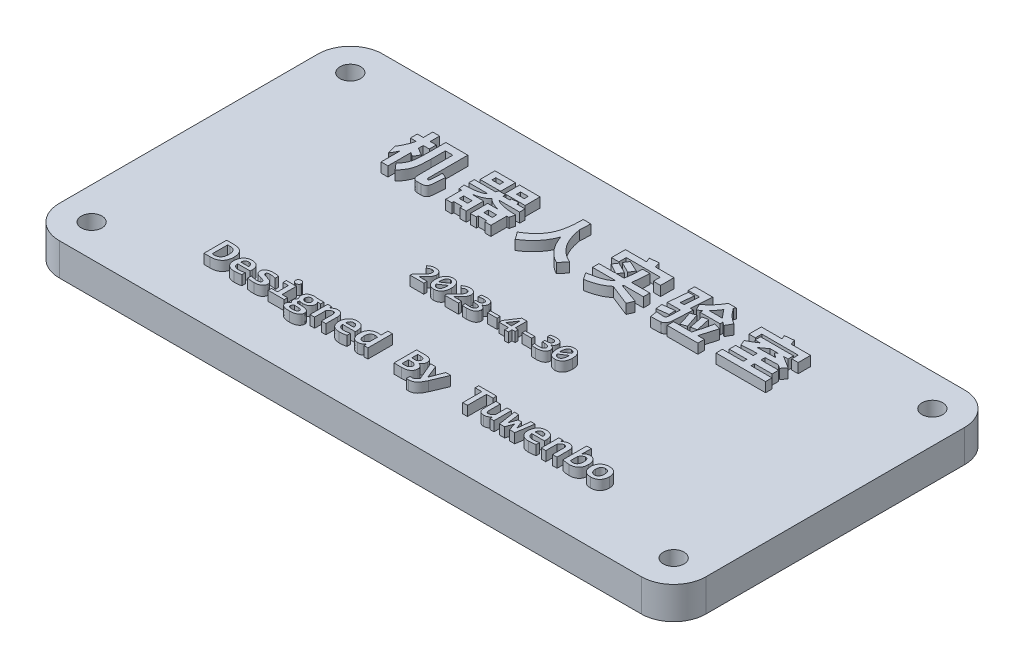
from build123d import *

# Parameters (mm, degrees)
SKETCH_1_W          = 100
SKETCH_1_H          = 50
EXTRUDE_1_DEPTH     = 5
SKETCH_3_R          = 1.6
CUT_EXTRUDE_3_DEPTH = 57.124860802
FILLET_1_R          = 5
SKETCH_4_W          = 1.472685535
SKETCH_4_H          = 0.478263447
SKETCH_4_W_2        = 3.177475506
SKETCH_4_H_2        = 2.305651161
SKETCH_4_W_3        = 1.19965912
SKETCH_4_H_3        = 0.614840309
SKETCH_4_W_4        = 3.170270347
SKETCH_4_W_5        = 1.18284708
SKETCH_4_W_6        = 1.296928778
SKETCH_4_H_4        = 0.691695348
SKETCH_4_W_7        = 1.288522758
EXTRUDE_2_DEPTH     = 1.5


with BuildPart() as part:
    # 草图1 → 凸台-拉伸1 (new body)
    with BuildSketch(Plane(origin=(0, 0, 0), x_dir=(1, 0, 0), z_dir=(0, 1, 0))):
        Rectangle(SKETCH_1_W, SKETCH_1_H)
    extrude(amount=EXTRUDE_1_DEPTH)

    # 草图3 → 切除-拉伸3 (cut, through all)
    with BuildSketch(Plane(origin=(0, 5, 0), x_dir=(1, 0, 0), z_dir=(0, 1, 0))):
        with Locations((-45, 20)):
            Circle(SKETCH_3_R)
        with Locations((45, 20)):
            Circle(SKETCH_3_R)
        with Locations((45, -20)):
            Circle(SKETCH_3_R)
        with Locations((-45, -20)):
            Circle(SKETCH_3_R)
    extrude(amount=-CUT_EXTRUDE_3_DEPTH, mode=Mode.SUBTRACT)

    # 圆角1
    fillet_1_edges = [part.edges().sort_by_distance(p)[0] for p in [
        (50, 2.5, -25),
        (50, 2.5, 25),
        (-50, 2.5, 25),
        (-50, 2.5, -25),
    ]]
    fillet(fillet_1_edges, radius=FILLET_1_R)

    # 草图4 → 凸台-拉伸2 (add)
    # profile 1 of 44: a face of its own
    with BuildSketch(Plane(origin=(0, 5, 0), x_dir=(1, 0, 0), z_dir=(0, 1, 0))):
        with BuildLine():
            add(Edge.make_bspline(
                [(-27.788936749, -15.205962367), (-27.789923103, -15.272414312), (-27.791849813, -15.40221917), (-27.813728034, -15.592277503), (-27.845935319, -15.77326707), (-27.893535202, -15.944457367), (-27.955367543, -16.104629737), (-28.031619609, -16.253664061), (-28.124178484, -16.390022149), (-28.232104653, -16.513852538), (-28.355124734, -16.625101051), (-28.494761809, -16.722431746), (-28.650312005, -16.806371514), (-28.791132266, -16.864997445), (-28.911903266, -16.903309292), (-29.007532855, -16.929915751), (-29.107893878, -16.95060082), (-29.212238719, -16.969685744), (-29.321501955, -16.982203765), (-29.434932112, -16.993184097), (-29.552778422, -16.998224588), (-29.632695943, -16.99940059), (-29.673430061, -17)],
                knots=[0, 0, 0, 0, 1.339270588, 2.616083371, 3.852472806, 5.042886145, 6.192707973, 7.308981617, 8.410959331, 9.507153501, 10.613510089, 11.746826291, 12.930482943, 14.171441622, 14.81570182, 15.484566853, 16.171783342, 16.881096551, 17.622618067, 18.388386392, 19.178557362, 20, 20, 20, 20], degree=3))
            Line((-29.673430061, -17), (-30.627975516, -17))
            Line((-30.627975516, -17), (-30.627975516, -13.5))
            Line((-30.627975516, -13.5), (-29.514735888, -13.5))
            add(Edge.make_bspline(
                [(-29.514735888, -13.5), (-29.445122557, -13.501103526), (-29.310116715, -13.503243668), (-29.114253142, -13.523007774), (-28.931389924, -13.552690457), (-28.762031917, -13.597528814), (-28.605989316, -13.654142685), (-28.462997712, -13.72434326), (-28.333716135, -13.808485669), (-28.218496278, -13.907367947), (-28.115729973, -14.018855356), (-28.028333407, -14.145994675), (-27.953073172, -14.286246354), (-27.893462636, -14.441692251), (-27.845177283, -14.61095808), (-27.813270907, -14.795832813), (-27.791727168, -14.99571115), (-27.789888867, -15.134222626), (-27.788936749, -15.205962367)],
                knots=[0, 0, 0, 0, 1.195039224, 2.317620401, 3.377139631, 4.373021474, 5.321371868, 6.223208679, 7.102484996, 7.96260887, 8.824158507, 9.698541553, 10.60475934, 11.551062917, 12.551738641, 13.622557741, 14.768642881, 16, 16, 16, 16], degree=3))
        make_face()
        with BuildLine():
            add(Edge.make_bspline(
                [(-28.54828837, -15.248809794), (-28.548975243, -15.202779803), (-28.550314736, -15.113015347), (-28.558437932, -14.98232478), (-28.574837582, -14.85952445), (-28.595611184, -14.74428786), (-28.623674833, -14.636689453), (-28.660945953, -14.537622751), (-28.707191764, -14.447495062), (-28.761338944, -14.365678372), (-28.824633454, -14.292380763), (-28.898267185, -14.22839789), (-28.982334512, -14.174303982), (-29.076361909, -14.129871574), (-29.180690823, -14.093503756), (-29.296906816, -14.068995529), (-29.424924996, -14.053652406), (-29.514158679, -14.052213606), (-29.560757198, -14.051462253)],
                knots=[0, 0, 0, 0, 1.218371452, 2.375982453, 3.463079655, 4.495568343, 5.473631211, 6.401928168, 7.291074635, 8.149230813, 8.992816023, 9.846276843, 10.721984275, 11.629999806, 12.593016209, 13.639318857, 14.767234056, 16, 16, 16, 16], degree=3))
            Line((-29.560757198, -14.051462253), (-29.920199501, -14.051462253))
            Line((-29.920199501, -14.051462253), (-29.920199501, -16.448537747))
            Line((-29.920199501, -16.448537747), (-29.609952392, -16.448537747))
            add(Edge.make_bspline(
                [(-29.609952392, -16.448537747), (-29.567856669, -16.447635565), (-29.486085065, -16.445883063), (-29.367232098, -16.43198882), (-29.255951084, -16.410594727), (-29.15272738, -16.378282534), (-29.056825239, -16.338214586), (-28.969093286, -16.287811431), (-28.889154277, -16.228765293), (-28.816780078, -16.160684812), (-28.752884352, -16.082354385), (-28.698114248, -15.993242125), (-28.651133907, -15.894346223), (-28.613192385, -15.784940964), (-28.584270675, -15.665284984), (-28.562941463, -15.535623133), (-28.550207669, -15.395593229), (-28.548942365, -15.298825787), (-28.54828837, -15.248809794)],
                knots=[0, 0, 0, 0, 1.098534894, 2.133921312, 3.119638754, 4.052102719, 4.952315074, 5.827504701, 6.686393811, 7.541082541, 8.414500278, 9.316854583, 10.264932512, 11.267170637, 12.333827785, 13.474532274, 14.694666568, 16, 16, 16, 16], degree=3))
        make_face(mode=Mode.SUBTRACT)
    # profile 2 of 44: a face of its own
    with BuildSketch(Plane(origin=(0, 5, 0), x_dir=(1, 0, 0), z_dir=(0, 1, 0))):
        with BuildLine():
            add(Edge.make_bspline(
                [(-24.680117887, -15.430514623), (-24.680191047, -15.456175475), (-24.680357048, -15.514400488), (-24.685337781, -15.607184883), (-24.688497927, -15.706781388), (-24.694619045, -15.773577834), (-24.697574246, -15.805826343)],
                knots=[0, 0, 0, 0, 0.819208232, 1.858800732, 2.966255104, 4, 4, 4, 4], degree=3))
            Line((-24.697574246, -15.805826343), (-26.618567218, -15.805826343))
            add(Edge.make_bspline(
                [(-26.618567218, -15.805826343), (-26.617818158, -15.834962119), (-26.616368726, -15.891339875), (-26.604786984, -15.973405289), (-26.587105444, -16.050142527), (-26.56129476, -16.12165719), (-26.52907383, -16.187590371), (-26.48940636, -16.247461343), (-26.445115001, -16.302848859), (-26.393838313, -16.351926514), (-26.337388402, -16.396336792), (-26.274176871, -16.43272859), (-26.207003409, -16.466177373), (-26.134077302, -16.492867136), (-26.056132615, -16.51313688), (-25.97397973, -16.528484138), (-25.887695755, -16.536989951), (-25.828816527, -16.538318604), (-25.798911811, -16.538993426)],
                knots=[0, 0, 0, 0, 1.122525342, 2.17208762, 3.188347491, 4.152499373, 5.096224877, 6.009506793, 6.915419497, 7.823795247, 8.739350144, 9.676445175, 10.629321307, 11.629189647, 12.66278807, 13.730511061, 14.847328257, 16, 16, 16, 16], degree=3))
            add(Edge.make_bspline(
                [(-25.798911811, -16.538993426), (-25.725337223, -16.537211127), (-25.573125372, -16.533523889), (-25.337959597, -16.510625779), (-25.090261479, -16.471233799), (-24.923439975, -16.429460737), (-24.83801859, -16.408070732)],
                knots=[0, 0, 0, 0, 0.908028547, 1.878538621, 2.913700189, 4, 4, 4, 4], degree=3))
            Line((-24.83801859, -16.408070732), (-24.83801859, -16.927794151))
            add(Edge.make_bspline(
                [(-24.83801859, -16.927794151), (-24.877113512, -16.9372614), (-24.958456245, -16.956959404), (-25.084573214, -16.983062725), (-25.217458495, -17.004084984), (-25.353398934, -17.025796477), (-25.492185154, -17.041050024), (-25.631325688, -17.053061671), (-25.769209145, -17.060453135), (-25.860265159, -17.061415449), (-25.905236908, -17.061890728)],
                knots=[0, 0, 0, 0, 0.895435167, 1.863084521, 2.865885183, 3.89009794, 4.927176399, 5.973058979, 6.998912005, 8, 8, 8, 8], degree=3))
            add(Edge.make_bspline(
                [(-25.905236908, -17.061890728), (-25.959508152, -17.060912715), (-26.065408458, -17.059004303), (-26.219965839, -17.041562597), (-26.366234875, -17.015601834), (-26.503309472, -16.97652455), (-26.630804258, -16.926425578), (-26.748820396, -16.866213549), (-26.856696992, -16.795276768), (-26.954152082, -16.71383819), (-27.041516435, -16.621920173), (-27.117347083, -16.519271612), (-27.183443473, -16.407044197), (-27.237035954, -16.284085847), (-27.280191946, -16.151327557), (-27.309781086, -16.008163839), (-27.328381278, -15.855247276), (-27.330702567, -15.749810837), (-27.331897529, -15.695533893)],
                knots=[0, 0, 0, 0, 1.158812792, 2.261209078, 3.318306076, 4.328674016, 5.300133512, 6.240050334, 7.153551294, 8.051938629, 8.947087239, 9.855525563, 10.772130771, 11.723187236, 12.714742641, 13.748530747, 14.840980659, 16, 16, 16, 16], degree=3))
            add(Edge.make_bspline(
                [(-27.331897529, -15.695533893), (-27.330672688, -15.641523605), (-27.328269832, -15.535567885), (-27.309594405, -15.380570091), (-27.279852844, -15.232773281), (-27.236885709, -15.093140744), (-27.182758477, -14.961760574), (-27.118933809, -14.83951621), (-27.04424897, -14.727189348), (-26.960099097, -14.624750819), (-26.866452285, -14.531704507), (-26.761361512, -14.451868628), (-26.648444188, -14.381137532), (-26.525497673, -14.323417645), (-26.394210352, -14.27724498), (-26.254908452, -14.244097774), (-26.108174727, -14.223757242), (-26.007925914, -14.221581092), (-25.956812514, -14.220471548)],
                knots=[0, 0, 0, 0, 1.140914347, 2.23821063, 3.293653313, 4.322469491, 5.319795367, 6.292196837, 7.23146743, 8.164533085, 9.089243839, 10.013650584, 10.947234893, 11.899646932, 12.877045788, 13.882790959, 14.920508392, 16, 16, 16, 16], degree=3))
            add(Edge.make_bspline(
                [(-25.956812514, -14.220471548), (-25.906517481, -14.221508565), (-25.80854661, -14.223528594), (-25.666080834, -14.240027405), (-25.532919023, -14.26892361), (-25.408569504, -14.307299988), (-25.293959029, -14.357230297), (-25.187773743, -14.414253989), (-25.092729379, -14.482976355), (-25.006532724, -14.558783526), (-24.931229652, -14.644000042), (-24.863220958, -14.735126737), (-24.808491452, -14.836312015), (-24.761162292, -14.943264917), (-24.724945826, -15.05719117), (-24.698535223, -15.176646707), (-24.683605754, -15.301859211), (-24.681294859, -15.387100186), (-24.680117887, -15.430514623)],
                knots=[0, 0, 0, 0, 1.213784602, 2.36435941, 3.454979087, 4.498857262, 5.499742812, 6.46830447, 7.40189892, 8.324382675, 9.233089769, 10.142245252, 11.062428766, 12.002981996, 12.961965527, 13.942466988, 14.952069275, 16, 16, 16, 16], degree=3))
        make_face()
        with BuildLine():
            add(Edge.make_bspline(
                [(-25.393448198, -15.33688506), (-25.393591202, -15.310955595), (-25.393867616, -15.260836338), (-25.40058087, -15.187887228), (-25.415142909, -15.120497097), (-25.434740295, -15.057854131), (-25.460804461, -15.001099426), (-25.488605267, -14.94774104), (-25.523239691, -14.90131546), (-25.560777447, -14.85938809), (-25.602009786, -14.822840323), (-25.646923562, -14.791742758), (-25.694788798, -14.765397272), (-25.762984078, -14.736739955), (-25.855854934, -14.712999066), (-25.932585455, -14.709470214), (-25.971888461, -14.707662662)],
                knots=[0, 0, 0, 0, 1.124067985, 2.172719438, 3.169089785, 4.108391202, 5.011940672, 5.874079407, 6.711299583, 7.515102288, 8.311260907, 9.093841728, 9.87910665, 10.675678106, 12.297211606, 14, 14, 14, 14], degree=3))
            add(Edge.make_bspline(
                [(-25.971888461, -14.707662662), (-25.993341797, -14.708028065), (-26.03560872, -14.708747975), (-26.097405644, -14.71715721), (-26.156560684, -14.72937791), (-26.212401897, -14.748175347), (-26.265904807, -14.7707986), (-26.315879015, -14.799776011), (-26.363298167, -14.833081522), (-26.406466017, -14.872367011), (-26.447534311, -14.914830591), (-26.4828848, -14.963045819), (-26.515296174, -15.01466738), (-26.5415377, -15.07161845), (-26.566121525, -15.13155515), (-26.583680533, -15.196458456), (-26.598374132, -15.265033193), (-26.604374583, -15.312492479), (-26.607458626, -15.33688506)],
                knots=[0, 0, 0, 0, 1.03606682, 2.041237521, 3.008976361, 3.950790056, 4.883977067, 5.811456459, 6.73717258, 7.678726023, 8.62814208, 9.586805915, 10.562363805, 11.568590486, 12.612981784, 13.689269041, 14.812356896, 16, 16, 16, 16], degree=3))
            Line((-26.607458626, -15.33688506), (-25.393448198, -15.33688506))
        make_face(mode=Mode.SUBTRACT)
    # profile 3 of 44: a face of its own
    with BuildSketch(Plane(origin=(0, 5, 0), x_dir=(1, 0, 0), z_dir=(0, 1, 0))):
        with BuildLine():
            add(Edge.make_bspline(
                [(-21.564951258, -16.199387894), (-21.566314588, -16.236777379), (-21.568966641, -16.309510268), (-21.589767686, -16.414464268), (-21.624769383, -16.510908389), (-21.674101086, -16.597990247), (-21.73399032, -16.676921061), (-21.803802486, -16.747745763), (-21.881920435, -16.811892107), (-21.969442519, -16.86704339), (-22.064289259, -16.914117799), (-22.164784269, -16.956017531), (-22.271887043, -16.989754871), (-22.384188086, -17.016245949), (-22.499702362, -17.036874831), (-22.617355082, -17.050855044), (-22.736501476, -17.059930711), (-22.816502916, -17.061235017), (-22.856721832, -17.061890728)],
                knots=[0, 0, 0, 0, 1.032124002, 2.00776661, 2.941456625, 3.853929554, 4.761241263, 5.67043317, 6.594586693, 7.547063288, 8.520625165, 9.516380649, 10.55139605, 11.61804977, 12.701383376, 13.790514192, 14.889230958, 16, 16, 16, 16], degree=3))
            add(Edge.make_bspline(
                [(-22.856721832, -17.061890728), (-22.909096948, -17.061677435), (-23.011233896, -17.061261491), (-23.160442235, -17.055388451), (-23.301736136, -17.046844657), (-23.477492472, -17.031326453), (-23.685709404, -17.00292749), (-23.847417269, -16.968430597), (-23.926320562, -16.951598277)],
                knots=[0, 0, 0, 0, 0.874765221, 1.705883532, 2.493748632, 3.238888269, 4.652750683, 6, 6, 6, 6], degree=3))
            Line((-23.926320562, -16.951598277), (-23.926320562, -16.362842893))
            add(Edge.make_bspline(
                [(-23.926320562, -16.362842893), (-23.88151539, -16.379439309), (-23.792609003, -16.412371387), (-23.657664947, -16.453206017), (-23.523000278, -16.487859027), (-23.388834737, -16.514241303), (-23.25650094, -16.53512493), (-23.127517394, -16.549064366), (-23.002326731, -16.558371351), (-22.92021524, -16.559741584), (-22.879732487, -16.560417139)],
                knots=[0, 0, 0, 0, 1.070632124, 2.124442964, 3.158155647, 4.185834042, 5.18769799, 6.159798702, 7.092740687, 8, 8, 8, 8], degree=3))
            add(Edge.make_bspline(
                [(-22.879732487, -16.560417139), (-22.836544279, -16.559846683), (-22.755648527, -16.558778163), (-22.643318699, -16.542274238), (-22.547152898, -16.519464051), (-22.469074105, -16.483520028), (-22.407528044, -16.439607345), (-22.363210599, -16.388067269), (-22.335547086, -16.329076357), (-22.332295746, -16.287218505), (-22.330650646, -16.266039447)],
                knots=[0, 0, 0, 0, 1.50019932, 2.810020519, 3.941044855, 4.924526879, 5.779938974, 6.550111968, 7.26639182, 8, 8, 8, 8], degree=3))
            add(Edge.make_bspline(
                [(-22.330650646, -16.266039447), (-22.331962423, -16.246270498), (-22.334545336, -16.207345083), (-22.353529368, -16.161014036), (-22.376861104, -16.127234372), (-22.40069237, -16.101796323), (-22.431760866, -16.078168922), (-22.468548791, -16.054167471), (-22.512629579, -16.030385108), (-22.564370204, -16.006708592), (-22.624373865, -15.983060989), (-22.692852665, -15.958277396), (-22.771236186, -15.933407844), (-22.859316667, -15.904647134), (-22.959590219, -15.87794247), (-23.029975289, -15.858761346), (-23.066991612, -15.84867377)],
                knots=[0, 0, 0, 0, 0.919858594, 1.811218118, 2.290401273, 2.831658123, 3.42907801, 4.106745327, 4.879818677, 5.763199174, 6.759960387, 7.888004473, 9.160120267, 10.596292109, 12.209950592, 14, 14, 14, 14], degree=3))
            add(Edge.make_bspline(
                [(-23.066991612, -15.84867377), (-23.101706085, -15.839116141), (-23.169326928, -15.820498691), (-23.266981819, -15.78951017), (-23.358284619, -15.756956536), (-23.44347112, -15.72335985), (-23.521549136, -15.68616777), (-23.592206616, -15.645245634), (-23.657224623, -15.603194715), (-23.713603507, -15.555500096), (-23.764668455, -15.505729544), (-23.806901417, -15.450525865), (-23.844389995, -15.392830669), (-23.874712318, -15.330568315), (-23.897734516, -15.26307001), (-23.914088023, -15.190717013), (-23.924921101, -15.112921923), (-23.925843158, -15.059209149), (-23.926320562, -15.031398776)],
                knots=[0, 0, 0, 0, 1.329983133, 2.590694135, 3.783552779, 4.910235381, 5.972147374, 6.974354698, 7.925493423, 8.827436623, 9.697926993, 10.553986972, 11.388762778, 12.236474579, 13.104713984, 14.017179509, 14.973373126, 16, 16, 16, 16], degree=3))
            add(Edge.make_bspline(
                [(-23.926320562, -15.031398776), (-23.925475359, -15.004087306), (-23.923796302, -14.949831155), (-23.908122474, -14.869760343), (-23.882383167, -14.792387055), (-23.84743912, -14.717253718), (-23.801806574, -14.645570661), (-23.746246715, -14.578001972), (-23.680056153, -14.51597705), (-23.605387147, -14.457529108), (-23.519920083, -14.405502451), (-23.424880464, -14.358508126), (-23.320004389, -14.317507066), (-23.205226068, -14.282428977), (-23.080467991, -14.255157379), (-22.945919562, -14.234261965), (-22.801120571, -14.22263878), (-22.701221584, -14.221209658), (-22.649625935, -14.220471548)],
                knots=[0, 0, 0, 0, 0.778588735, 1.546721197, 2.317517968, 3.100737402, 3.904659711, 4.73561213, 5.589647666, 6.487786701, 7.436494636, 8.438821087, 9.509441685, 10.645708175, 11.859563896, 13.149896546, 14.52798372, 16, 16, 16, 16], degree=3))
            add(Edge.make_bspline(
                [(-22.649625935, -14.220471548), (-22.604923631, -14.220776509), (-22.518137142, -14.221368569), (-22.391890769, -14.225916712), (-22.273601249, -14.23461284), (-22.162830412, -14.246870639), (-22.059160776, -14.260319347), (-21.961833444, -14.27472216), (-21.870783465, -14.289528952), (-21.812226697, -14.300748434), (-21.783949218, -14.306166402)],
                knots=[0, 0, 0, 0, 1.231226655, 2.390342962, 3.47874024, 4.497213995, 5.459531998, 6.357905527, 7.207020893, 8, 8, 8, 8], degree=3))
            Line((-21.783949218, -14.306166402), (-21.783949218, -14.838585355))
            add(Edge.make_bspline(
                [(-21.783949218, -14.838585355), (-21.824836504, -14.82653818), (-21.905115884, -14.802884378), (-22.025068239, -14.775055172), (-22.140821196, -14.750701474), (-22.289542261, -14.726713593), (-22.472165679, -14.70703398), (-22.617832858, -14.703741595), (-22.690092949, -14.702108365)],
                knots=[0, 0, 0, 0, 0.834139686, 1.637776022, 2.409409407, 3.149013963, 4.58573144, 6, 6, 6, 6], degree=3))
            add(Edge.make_bspline(
                [(-22.690092949, -14.702108365), (-22.72426536, -14.702979586), (-22.789461144, -14.704641743), (-22.882069522, -14.718225282), (-22.964669674, -14.739653975), (-23.035469344, -14.771210807), (-23.093999962, -14.81006383), (-23.13599084, -14.858298121), (-23.163143559, -14.914057105), (-23.16567254, -14.954388001), (-23.166968941, -14.975062344)],
                knots=[0, 0, 0, 0, 1.345538216, 2.567083145, 3.679214592, 4.695880722, 5.60921709, 6.421786148, 7.190979149, 8, 8, 8, 8], degree=3))
            add(Edge.make_bspline(
                [(-23.166968941, -14.975062344), (-23.165840998, -14.994788556), (-23.163663034, -15.032878233), (-23.147115452, -15.078369867), (-23.12557987, -15.110987674), (-23.10221529, -15.134252079), (-23.0731161, -15.157481101), (-23.037776966, -15.180559311), (-22.995523851, -15.203475228), (-22.945631429, -15.226220921), (-22.889008633, -15.250946671), (-22.823796396, -15.275577403), (-22.74951887, -15.301227618), (-22.664594175, -15.326832425), (-22.56906781, -15.355159777), (-22.501305531, -15.37280158), (-22.465540694, -15.3821129)],
                knots=[0, 0, 0, 0, 0.956479233, 1.846882031, 2.310214077, 2.84640573, 3.440455626, 4.117642611, 4.894009661, 5.773589893, 6.780942714, 7.895461331, 9.159327989, 10.598241848, 12.204556704, 14, 14, 14, 14], degree=3))
            add(Edge.make_bspline(
                [(-22.465540694, -15.3821129), (-22.424988827, -15.393191586), (-22.346671662, -15.414587675), (-22.235256399, -15.450143478), (-22.133974583, -15.486879951), (-22.041922537, -15.523765628), (-21.959506825, -15.563731096), (-21.884599127, -15.604383125), (-21.819863064, -15.649927151), (-21.762495593, -15.697107631), (-21.712891143, -15.74705124), (-21.67131848, -15.800763938), (-21.63669598, -15.85759791), (-21.60957184, -15.918157265), (-21.590140584, -15.982875552), (-21.574402519, -16.050866364), (-21.567161223, -16.123855025), (-21.565702183, -16.173722547), (-21.564951258, -16.199387894)],
                knots=[0, 0, 0, 0, 1.513277974, 2.922569281, 4.208717928, 5.391646385, 6.490414694, 7.504967252, 8.455861326, 9.334863596, 10.176507037, 10.984066037, 11.774433116, 12.567205491, 13.365278083, 14.203899843, 15.075600055, 16, 16, 16, 16], degree=3))
        make_face()
    # profile 4 of 44: a face of its own
    with BuildSketch(Plane(origin=(0, 5, 0), x_dir=(1, 0, 0), z_dir=(0, 1, 0))):
        with BuildLine():
            add(Edge.make_bspline(
                [(-19.005214237, -13.534912718), (-19.006801452, -13.563702562), (-19.009942192, -13.62067114), (-19.037799824, -13.701724444), (-19.078881248, -13.775177709), (-19.13434857, -13.839024723), (-19.203240891, -13.889621432), (-19.281207777, -13.930078323), (-19.36952937, -13.955133544), (-19.431413606, -13.958494888), (-19.463046928, -13.960213104)],
                knots=[0, 0, 0, 0, 0.991865131, 1.962676381, 2.928228079, 3.886576981, 4.85872014, 5.863919694, 6.908101313, 8, 8, 8, 8], degree=3))
            add(Edge.make_bspline(
                [(-19.463046928, -13.960213104), (-19.494683713, -13.958488262), (-19.556829609, -13.955100061), (-19.645796873, -13.929855097), (-19.724924898, -13.890078085), (-19.794179862, -13.839017079), (-19.849393779, -13.774940607), (-19.891857098, -13.702122947), (-19.918238066, -13.620480376), (-19.921572516, -13.563665757), (-19.923260032, -13.534912718)],
                knots=[0, 0, 0, 0, 1.088247929, 2.137705954, 3.155801041, 4.124693844, 5.079838511, 6.046675125, 7.011451166, 8, 8, 8, 8], degree=3))
            add(Edge.make_bspline(
                [(-19.923260032, -13.534912718), (-19.921571657, -13.506159184), (-19.918235509, -13.449343585), (-19.891867046, -13.367708232), (-19.849255271, -13.2946898), (-19.793723214, -13.230225647), (-19.725765388, -13.176197742), (-19.645545826, -13.137218519), (-19.557044129, -13.110269621), (-19.494724066, -13.107729557), (-19.463046928, -13.106438449)],
                knots=[0, 0, 0, 0, 0.985440212, 1.947182387, 2.910978654, 3.869975195, 4.852442477, 5.867336028, 6.915972059, 8, 8, 8, 8], degree=3))
            add(Edge.make_bspline(
                [(-19.463046928, -13.106438449), (-19.431372697, -13.107721632), (-19.369313119, -13.110235783), (-19.281457303, -13.136988538), (-19.202408916, -13.176667242), (-19.134807429, -13.23021937), (-19.079017247, -13.294451467), (-19.037789616, -13.368106668), (-19.009944815, -13.449152838), (-19.006802333, -13.506122385), (-19.005214237, -13.534912718)],
                knots=[0, 0, 0, 0, 1.087650227, 2.131041923, 3.133067305, 4.118817507, 5.081018541, 6.043521266, 7.011266934, 8, 8, 8, 8], degree=3))
        make_face()
    # profile 5 of 44: a face of its own
    with BuildSketch(Plane(origin=(0, 5, 0), x_dir=(1, 0, 0), z_dir=(0, 1, 0))):
        Polygon((-19.782022217, -14.787803219), (-20.60723192, -14.787803219), (-20.60723192, -14.279188393), (-19.063137611, -14.279188393), (-19.063137611, -16.491385173), (-18.220471548, -16.491385173), (-18.220471548, -17), (-20.70800272, -17), (-20.70800272, -16.491385173), (-19.782022217, -16.491385173), align=None)
    # profile 6 of 44: a face of its own
    with BuildSketch(Plane(origin=(0, 5, 0), x_dir=(1, 0, 0), z_dir=(0, 1, 0))):
        with BuildLine():
            add(Edge.make_bspline(
                [(-15.283835865, -14.756064384), (-15.271135914, -14.771730592), (-15.246281158, -14.802390534), (-15.214205776, -14.851015826), (-15.188605987, -14.901066569), (-15.163807844, -14.96917585), (-15.141172431, -15.056177578), (-15.138418346, -15.127511472), (-15.137043754, -15.16311494)],
                knots=[0, 0, 0, 0, 0.820418257, 1.605620005, 2.366235925, 3.101995707, 4.553576727, 6, 6, 6, 6], degree=3))
            add(Edge.make_bspline(
                [(-15.137043754, -15.16311494), (-15.138111074, -15.199940372), (-15.140194654, -15.271829499), (-15.156382103, -15.376132858), (-15.182269778, -15.474092903), (-15.219917648, -15.564758715), (-15.266883937, -15.648629191), (-15.32311787, -15.725102523), (-15.386757755, -15.795835155), (-15.460031689, -15.858470876), (-15.541819492, -15.912953649), (-15.630016213, -15.962129919), (-15.726796263, -16.001844685), (-15.829732928, -16.036373288), (-15.939788967, -16.062089241), (-16.055333362, -16.081151739), (-16.176802072, -16.092292554), (-16.259517847, -16.093851655), (-16.301858989, -16.094649739)],
                knots=[0, 0, 0, 0, 1.049671988, 2.049127388, 3.002323019, 3.932321009, 4.840690698, 5.736766237, 6.633730047, 7.54830923, 8.477083134, 9.432335349, 10.422671466, 11.455380204, 12.525526233, 13.641442265, 14.792684617, 16, 16, 16, 16], degree=3))
            add(Edge.make_bspline(
                [(-16.301858989, -16.094649739), (-16.350861805, -16.093314704), (-16.445364025, -16.090740082), (-16.559865711, -16.073340365), (-16.642150901, -16.053042486), (-16.695014976, -16.036914943), (-16.740627255, -16.02114208), (-16.767221469, -16.007386046), (-16.779528452, -16.001020177)],
                knots=[0, 0, 0, 0, 1.796670528, 3.464889749, 4.234212764, 4.903179195, 5.492425116, 6, 6, 6, 6], degree=3))
            add(Edge.make_bspline(
                [(-16.779528452, -16.001020177), (-16.79503927, -16.016510314), (-16.825997366, -16.047427131), (-16.864332138, -16.100179409), (-16.892337239, -16.160399935), (-16.895401222, -16.204102191), (-16.89696214, -16.226365903)],
                knots=[0, 0, 0, 0, 1.004576497, 2.005037668, 2.983684757, 4, 4, 4, 4], degree=3))
            add(Edge.make_bspline(
                [(-16.89696214, -16.226365903), (-16.895878808, -16.240814537), (-16.893635395, -16.270735435), (-16.874797567, -16.313899794), (-16.846091414, -16.354554955), (-16.806275881, -16.390753383), (-16.75651919, -16.420174497), (-16.698985758, -16.445262806), (-16.632566786, -16.462146825), (-16.585231627, -16.46519627), (-16.560530492, -16.466787577)],
                knots=[0, 0, 0, 0, 0.76173155, 1.577428904, 2.450711486, 3.381380597, 4.398648445, 5.495254245, 6.69293641, 8, 8, 8, 8], degree=3))
            Line((-16.560530492, -16.466787577), (-15.867830424, -16.491385173))
            add(Edge.make_bspline(
                [(-15.867830424, -16.491385173), (-15.829991242, -16.492913338), (-15.755781243, -16.495910365), (-15.647317283, -16.505768835), (-15.544515628, -16.522555104), (-15.447625834, -16.54492821), (-15.356395894, -16.571302496), (-15.271730999, -16.604007646), (-15.193952757, -16.641996843), (-15.122597423, -16.685046328), (-15.058613101, -16.732983276), (-15.002034077, -16.786091814), (-14.95349322, -16.844132517), (-14.912801576, -16.906937523), (-14.880655037, -16.974372831), (-14.857450001, -17.046343395), (-14.843865218, -17.123270925), (-14.842022227, -17.176096376), (-14.84107912, -17.203128542)],
                knots=[0, 0, 0, 0, 1.303414544, 2.556249535, 3.74611039, 4.885660953, 5.977406329, 7.012090126, 8.005540623, 8.95326348, 9.876399332, 10.752266993, 11.618333229, 12.474389028, 13.321392991, 14.182227891, 15.069798431, 16, 16, 16, 16], degree=3))
            add(Edge.make_bspline(
                [(-14.84107912, -17.203128542), (-14.842054244, -17.234427644), (-14.843995237, -17.296728761), (-14.862530752, -17.388588438), (-14.89076262, -17.478124408), (-14.931880167, -17.563962331), (-14.983091153, -17.646255382), (-15.047927052, -17.722134148), (-15.123674521, -17.793048986), (-15.211379975, -17.858007287), (-15.31037937, -17.916747013), (-15.420431015, -17.96902218), (-15.541737444, -18.014978963), (-15.674233232, -18.054536537), (-15.818137917, -18.086426744), (-15.97362348, -18.107998587), (-16.140011178, -18.121650025), (-16.254751629, -18.123431852), (-16.313761052, -18.12434822)],
                knots=[0, 0, 0, 0, 0.776319354, 1.545270011, 2.317885888, 3.102274847, 3.902154632, 4.717812764, 5.572740063, 6.473795561, 7.422147294, 8.42677121, 9.495225991, 10.640089699, 11.857476198, 13.1512603, 14.534932656, 16, 16, 16, 16], degree=3))
            add(Edge.make_bspline(
                [(-16.313761052, -18.12434822), (-16.370637628, -18.123759546), (-16.480244605, -18.122625111), (-16.638654911, -18.113418718), (-16.784499927, -18.096585473), (-16.91844073, -18.074950456), (-17.040336456, -18.046321617), (-17.150640965, -18.012415234), (-17.24993826, -17.973818743), (-17.337576942, -17.929316611), (-17.414514972, -17.880269581), (-17.480073715, -17.825882434), (-17.535695422, -17.767629177), (-17.580784375, -17.704752195), (-17.613848917, -17.637025144), (-17.639113625, -17.566963397), (-17.653608333, -17.493073875), (-17.655404252, -17.442817217), (-17.656313761, -17.417365677)],
                knots=[0, 0, 0, 0, 1.619415458, 3.120779197, 4.515453305, 5.798089718, 6.981777326, 8.077511232, 9.08160416, 10.011169995, 10.871799558, 11.674039601, 12.430507067, 13.15975739, 13.867017174, 14.569651009, 15.275626617, 16, 16, 16, 16], degree=3))
            add(Edge.make_bspline(
                [(-17.656313761, -17.417365677), (-17.655177207, -17.387108204), (-17.652969463, -17.328333406), (-17.633258457, -17.242959964), (-17.599868792, -17.16319229), (-17.553697353, -17.087148129), (-17.495394558, -17.013477328), (-17.422127, -16.9436782), (-17.336975674, -16.873281538), (-17.273198376, -16.829928876), (-17.239741555, -16.807186579)],
                knots=[0, 0, 0, 0, 0.938016837, 1.822087051, 2.701611298, 3.610963462, 4.574944327, 5.608113554, 6.745244496, 8, 8, 8, 8], degree=3))
            add(Edge.make_bspline(
                [(-17.239741555, -16.807186579), (-17.262007764, -16.794186029), (-17.305443258, -16.768825389), (-17.363988219, -16.723382237), (-17.413693547, -16.67193433), (-17.455245899, -16.615817889), (-17.486617313, -16.55523225), (-17.510182707, -16.493038434), (-17.524100435, -16.428517666), (-17.526013291, -16.384860627), (-17.52697801, -16.362842893)],
                knots=[0, 0, 0, 0, 1.111349006, 2.167948455, 3.1844958, 4.188482756, 5.168261048, 6.117613001, 7.050648047, 8, 8, 8, 8], degree=3))
            add(Edge.make_bspline(
                [(-17.52697801, -16.362842893), (-17.525862691, -16.333367922), (-17.523687463, -16.275882289), (-17.503511231, -16.192532098), (-17.47259029, -16.115031422), (-17.435313642, -16.040364098), (-17.389442553, -15.969792001), (-17.337583122, -15.901687703), (-17.28129927, -15.835544674), (-17.241984332, -15.792487729), (-17.222285196, -15.770913625)],
                knots=[0, 0, 0, 0, 1.034890806, 2.018368507, 2.995804564, 3.964799354, 4.947617372, 5.950080191, 6.972867577, 8, 8, 8, 8], degree=3))
            add(Edge.make_bspline(
                [(-17.222285196, -15.770913625), (-17.239508867, -15.753735006), (-17.274171885, -15.719162653), (-17.321206221, -15.661704431), (-17.363034082, -15.598784498), (-17.401104945, -15.530861225), (-17.432760866, -15.455373425), (-17.454535523, -15.370983878), (-17.467018879, -15.277746836), (-17.46887714, -15.212878782), (-17.469848107, -15.178984357)],
                knots=[0, 0, 0, 0, 0.881947599, 1.774939091, 2.687553513, 3.619328341, 4.595621005, 5.647377668, 6.770723401, 8, 8, 8, 8], degree=3))
            add(Edge.make_bspline(
                [(-17.469848107, -15.178984357), (-17.468877496, -15.141881742), (-17.466988222, -15.069662297), (-17.449479017, -14.964647155), (-17.423024363, -14.865631229), (-17.384583819, -14.772952204), (-17.335861658, -14.687437039), (-17.27936814, -14.608065215), (-17.213778554, -14.536210639), (-17.139554729, -14.471822237), (-17.057474012, -14.414665854), (-16.968129559, -14.364609541), (-16.87183509, -14.321507843), (-16.768281067, -14.287047423), (-16.659049986, -14.259245367), (-16.544177548, -14.239559066), (-16.42457986, -14.227444582), (-16.343148374, -14.22597667), (-16.301858989, -14.225232374)],
                knots=[0, 0, 0, 0, 1.048930298, 2.041720339, 3.003862181, 3.943270735, 4.871435663, 5.783074078, 6.694159519, 7.617030543, 8.5574221, 9.519010896, 10.510531077, 11.537531789, 12.602882414, 13.696554666, 14.832050784, 16, 16, 16, 16], degree=3))
            add(Edge.make_bspline(
                [(-16.301858989, -14.225232374), (-16.25951307, -14.225778854), (-16.176562196, -14.226849348), (-16.055609098, -14.237034592), (-15.941691674, -14.250558358), (-15.870311666, -14.26991073), (-15.836091589, -14.279188393)],
                knots=[0, 0, 0, 0, 1.079991057, 2.115580508, 3.096596082, 4, 4, 4, 4], degree=3))
            Line((-15.836091589, -14.279188393), (-14.823622761, -14.279188393))
            Line((-14.823622761, -14.279188393), (-14.823622761, -14.756064384))
            Line((-14.823622761, -14.756064384), (-15.283835865, -14.756064384))
        make_face()
        with BuildLine():
            add(Edge.make_bspline(
                [(-16.937429154, -17.361822716), (-16.937058274, -17.374564294), (-16.936331905, -17.399518661), (-16.92805409, -17.435692428), (-16.914723621, -17.469400426), (-16.895022081, -17.499814339), (-16.870970215, -17.5281067), (-16.841112484, -17.553528672), (-16.806215244, -17.576473673), (-16.750431576, -17.603837427), (-16.668307773, -17.631070925), (-16.555547109, -17.653131897), (-16.425737613, -17.66745881), (-16.333375739, -17.668916501), (-16.28440263, -17.669689413)],
                knots=[0, 0, 0, 0, 0.573131859, 1.122478155, 1.662437683, 2.198039965, 2.747386262, 3.330345358, 3.958338171, 4.624518408, 6.124450988, 7.83991878, 9.794196856, 12, 12, 12, 12], degree=3))
            add(Edge.make_bspline(
                [(-16.28440263, -17.669689413), (-16.252656154, -17.669177993), (-16.191477216, -17.668192432), (-16.103715508, -17.662262577), (-16.023726744, -17.650970998), (-15.951239394, -17.6362679), (-15.88594782, -17.616918255), (-15.826894692, -17.595388138), (-15.773520199, -17.572318842), (-15.72715228, -17.544722526), (-15.686315178, -17.515725053), (-15.652169722, -17.483790754), (-15.623304647, -17.45017419), (-15.595612343, -17.401497105), (-15.571439591, -17.337222473), (-15.56746972, -17.283497322), (-15.565518023, -17.257084561)],
                knots=[0, 0, 0, 0, 1.44535429, 2.785356148, 4.001184617, 5.120531067, 6.149302331, 7.097782572, 7.981699573, 8.791217764, 9.549887305, 10.257025006, 10.915319697, 11.557561441, 12.799230111, 14, 14, 14, 14], degree=3))
            add(Edge.make_bspline(
                [(-15.565518023, -17.257084561), (-15.566730092, -17.234441217), (-15.569049101, -17.191118496), (-15.600254674, -17.133582747), (-15.644507362, -17.086075046), (-15.704046622, -17.049620935), (-15.774972891, -17.02005206), (-15.857483414, -16.999740012), (-15.949957664, -16.985705087), (-16.01483878, -16.981022912), (-16.048741782, -16.978576287)],
                knots=[0, 0, 0, 0, 0.872333959, 1.669006159, 2.485007981, 3.379011798, 4.36198571, 5.468375794, 6.677124203, 8, 8, 8, 8], degree=3))
            Line((-16.048741782, -16.978576287), (-16.666855588, -16.967467694))
            add(Edge.make_bspline(
                [(-16.666855588, -16.967467694), (-16.692581686, -16.984464729), (-16.740277564, -17.015977028), (-16.801899222, -17.066466475), (-16.851296333, -17.114351053), (-16.887278076, -17.162625589), (-16.914279348, -17.210294448), (-16.929124909, -17.259696448), (-16.936053142, -17.310296102), (-16.936962434, -17.344345762), (-16.937429154, -17.361822716)],
                knots=[0, 0, 0, 0, 1.46639082, 2.718671073, 3.786727152, 4.730764271, 5.575605706, 6.379806149, 7.168389562, 8, 8, 8, 8], degree=3))
        make_face(mode=Mode.SUBTRACT)
        with BuildLine():
            add(Edge.make_bspline(
                [(-16.819995466, -15.178984357), (-16.818368992, -15.213257707), (-16.815230808, -15.27938608), (-16.789756797, -15.373323049), (-16.74549712, -15.455534924), (-16.685608176, -15.526492869), (-16.608762006, -15.582562958), (-16.518040142, -15.622234516), (-16.414192469, -15.646475963), (-16.340616519, -15.648984587), (-16.301858989, -15.650306053)],
                knots=[0, 0, 0, 0, 1.037380268, 2.001562993, 2.919245228, 3.845700648, 4.791224888, 5.774005833, 6.827415243, 8, 8, 8, 8], degree=3))
            add(Edge.make_bspline(
                [(-16.301858989, -15.650306053), (-16.280928747, -15.649976421), (-16.240229008, -15.649335436), (-16.181678804, -15.640759077), (-16.126904217, -15.629517109), (-16.061474057, -15.606170453), (-15.988244708, -15.567918485), (-15.9148804, -15.50634509), (-15.858837549, -15.432136481), (-15.818933462, -15.348395963), (-15.794603512, -15.25756623), (-15.791587872, -15.194734457), (-15.790070279, -15.16311494)],
                knots=[0, 0, 0, 0, 0.789073307, 1.534386357, 2.229416173, 2.895461354, 4.150142501, 5.325877615, 6.479717579, 7.631483532, 8.808065657, 10, 10, 10, 10], degree=3))
            add(Edge.make_bspline(
                [(-15.790070279, -15.16311494), (-15.791608156, -15.126977249), (-15.794534944, -15.058202354), (-15.820410267, -14.961024623), (-15.863819886, -14.876620829), (-15.924456475, -14.805559383), (-16.00076311, -14.749133663), (-16.091051273, -14.708578126), (-16.195101411, -14.684573782), (-16.268663209, -14.682026488), (-16.307413285, -14.680684652)],
                knots=[0, 0, 0, 0, 1.080150984, 2.055672864, 2.983349275, 3.898682186, 4.8264937, 5.800729883, 6.841492645, 8, 8, 8, 8], degree=3))
            add(Edge.make_bspline(
                [(-16.307413285, -14.680684652), (-16.328336618, -14.681043993), (-16.369022922, -14.681742745), (-16.427725831, -14.689921519), (-16.482473342, -14.702645831), (-16.548415521, -14.725245764), (-16.622387897, -14.763789185), (-16.694885931, -14.827155467), (-16.751990767, -14.902465279), (-16.790882134, -14.98890032), (-16.815516166, -15.08215655), (-16.818495733, -15.146565033), (-16.819995466, -15.178984357)],
                knots=[0, 0, 0, 0, 0.779138119, 1.515066966, 2.203535911, 2.870507267, 4.109390779, 5.283135914, 6.430306666, 7.603223996, 8.79360834, 10, 10, 10, 10], degree=3))
        make_face(mode=Mode.SUBTRACT)
    # profile 7 of 44: a face of its own
    with BuildSketch(Plane(origin=(0, 5, 0), x_dir=(1, 0, 0), z_dir=(0, 1, 0))):
        with BuildLine():
            Line((-12.482090229, -17), (-12.482090229, -15.22738608))
            add(Edge.make_bspline(
                [(-12.482090229, -15.22738608), (-12.483018965, -15.192399751), (-12.484769053, -15.126472351), (-12.501142029, -15.03436), (-12.528414208, -14.955744356), (-12.567880943, -14.89062825), (-12.61986394, -14.840216803), (-12.683349832, -14.804094464), (-12.758048687, -14.783681978), (-12.811254506, -14.781180251), (-12.83915212, -14.779868511)],
                knots=[0, 0, 0, 0, 1.283430987, 2.418466605, 3.419704111, 4.322305325, 5.187470507, 6.048539886, 6.976783307, 8, 8, 8, 8], degree=3))
            add(Edge.make_bspline(
                [(-12.83915212, -14.779868511), (-12.868667434, -14.781703192), (-12.928168757, -14.785401812), (-13.016108161, -14.811058466), (-13.101268081, -14.854294375), (-13.183826366, -14.914445564), (-13.265917577, -14.98828613), (-13.350335475, -15.073933122), (-13.437228233, -15.171311402), (-13.4943224, -15.241688075), (-13.523917479, -15.278168216)],
                knots=[0, 0, 0, 0, 0.808956514, 1.630813802, 2.490304042, 3.415997679, 4.423007237, 5.515326191, 6.71205549, 8, 8, 8, 8], degree=3))
            Line((-13.523917479, -15.278168216), (-13.523917479, -17))
            Line((-13.523917479, -17), (-14.225345727, -17))
            Line((-14.225345727, -17), (-14.225345727, -14.279188393))
            Line((-14.225345727, -14.279188393), (-13.618340512, -14.279188393))
            Line((-13.618340512, -14.279188393), (-13.600884153, -14.680684652))
            add(Edge.make_bspline(
                [(-13.600884153, -14.680684652), (-13.57115569, -14.64722943), (-13.512469069, -14.581185856), (-13.418031301, -14.490011322), (-13.317036477, -14.409981975), (-13.208221878, -14.342441384), (-13.090706036, -14.288869794), (-12.963310189, -14.249846653), (-12.82378497, -14.224055423), (-12.726075632, -14.221703362), (-12.67490365, -14.220471548)],
                knots=[0, 0, 0, 0, 1.001455235, 1.976961438, 2.933826139, 3.880066762, 4.836363672, 5.815598531, 6.855993141, 8, 8, 8, 8], degree=3))
            add(Edge.make_bspline(
                [(-12.67490365, -14.220471548), (-12.638629268, -14.221127947), (-12.568222468, -14.222401983), (-12.466430685, -14.235207771), (-12.371696105, -14.256489655), (-12.284426167, -14.286907769), (-12.203426296, -14.323938868), (-12.130363903, -14.369625626), (-12.063598639, -14.421512151), (-12.004161812, -14.480733148), (-11.950136146, -14.545713033), (-11.905611814, -14.618784977), (-11.86564994, -14.696806991), (-11.835656002, -14.782234606), (-11.810706733, -14.872574373), (-11.793780749, -14.968494001), (-11.781939178, -15.069188791), (-11.781093432, -15.138216241), (-11.780661981, -15.173430061)],
                knots=[0, 0, 0, 0, 1.171958662, 2.274714443, 3.309537167, 4.304429662, 5.25676209, 6.181964497, 7.083199142, 7.983906547, 8.88914625, 9.807092677, 10.743756538, 11.717338839, 12.72728616, 13.770233817, 14.862501984, 16, 16, 16, 16], degree=3))
            Line((-11.780661981, -15.173430061), (-11.780661981, -17))
            Line((-11.780661981, -17), (-12.482090229, -17))
        make_face()
    # profile 8 of 44: a face of its own
    with BuildSketch(Plane(origin=(0, 5, 0), x_dir=(1, 0, 0), z_dir=(0, 1, 0))):
        with BuildLine():
            add(Edge.make_bspline(
                [(-8.429834505, -15.430514623), (-8.429907664, -15.456175475), (-8.430073666, -15.514400488), (-8.435054399, -15.607184883), (-8.438214544, -15.706781388), (-8.444335662, -15.773577834), (-8.447290864, -15.805826343)],
                knots=[0, 0, 0, 0, 0.819208232, 1.858800732, 2.966255104, 4, 4, 4, 4], degree=3))
            Line((-8.447290864, -15.805826343), (-10.368283836, -15.805826343))
            add(Edge.make_bspline(
                [(-10.368283836, -15.805826343), (-10.367534776, -15.834962119), (-10.366085343, -15.891339875), (-10.354503601, -15.973405289), (-10.336822062, -16.050142527), (-10.311011377, -16.12165719), (-10.278790448, -16.187590371), (-10.239122978, -16.247461343), (-10.194831618, -16.302848859), (-10.14355493, -16.351926514), (-10.08710502, -16.396336792), (-10.023893488, -16.43272859), (-9.956720027, -16.466177373), (-9.88379392, -16.492867136), (-9.805849232, -16.51313688), (-9.723696348, -16.528484138), (-9.637412372, -16.536989951), (-9.578533145, -16.538318604), (-9.548628429, -16.538993426)],
                knots=[0, 0, 0, 0, 1.122525342, 2.17208762, 3.188347491, 4.152499373, 5.096224877, 6.009506793, 6.915419497, 7.823795247, 8.739350144, 9.676445175, 10.629321307, 11.629189647, 12.66278807, 13.730511061, 14.847328257, 16, 16, 16, 16], degree=3))
            add(Edge.make_bspline(
                [(-9.548628429, -16.538993426), (-9.475053841, -16.537211127), (-9.32284199, -16.533523889), (-9.087676214, -16.510625779), (-8.839978097, -16.471233799), (-8.673156592, -16.429460737), (-8.587735207, -16.408070732)],
                knots=[0, 0, 0, 0, 0.908028547, 1.878538621, 2.913700189, 4, 4, 4, 4], degree=3))
            Line((-8.587735207, -16.408070732), (-8.587735207, -16.927794151))
            add(Edge.make_bspline(
                [(-8.587735207, -16.927794151), (-8.626830129, -16.9372614), (-8.708172862, -16.956959404), (-8.834289832, -16.983062725), (-8.967175112, -17.004084984), (-9.103115551, -17.025796477), (-9.241901771, -17.041050024), (-9.381042306, -17.053061671), (-9.518925763, -17.060453135), (-9.609981777, -17.061415449), (-9.654953525, -17.061890728)],
                knots=[0, 0, 0, 0, 0.895435167, 1.863084521, 2.865885183, 3.89009794, 4.927176399, 5.973058979, 6.998912005, 8, 8, 8, 8], degree=3))
            add(Edge.make_bspline(
                [(-9.654953525, -17.061890728), (-9.709224769, -17.060912715), (-9.815125075, -17.059004303), (-9.969682456, -17.041562597), (-10.115951492, -17.015601834), (-10.253026089, -16.97652455), (-10.380520876, -16.926425578), (-10.498537013, -16.866213549), (-10.60641361, -16.795276768), (-10.703868699, -16.71383819), (-10.791233052, -16.621920173), (-10.867063701, -16.519271612), (-10.933160091, -16.407044197), (-10.986752572, -16.284085847), (-11.029908564, -16.151327557), (-11.059497704, -16.008163839), (-11.078097896, -15.855247276), (-11.080419185, -15.749810837), (-11.081614146, -15.695533893)],
                knots=[0, 0, 0, 0, 1.158812792, 2.261209078, 3.318306076, 4.328674016, 5.300133512, 6.240050334, 7.153551294, 8.051938629, 8.947087239, 9.855525563, 10.772130771, 11.723187236, 12.714742641, 13.748530747, 14.840980659, 16, 16, 16, 16], degree=3))
            add(Edge.make_bspline(
                [(-11.081614146, -15.695533893), (-11.080389305, -15.641523605), (-11.077986449, -15.535567885), (-11.059311023, -15.380570091), (-11.029569461, -15.232773281), (-10.986602326, -15.093140744), (-10.932475095, -14.961760574), (-10.868650426, -14.83951621), (-10.793965587, -14.727189348), (-10.709815715, -14.624750819), (-10.616168902, -14.531704507), (-10.51107813, -14.451868628), (-10.398160805, -14.381137532), (-10.27521429, -14.323417645), (-10.14392697, -14.27724498), (-10.004625069, -14.244097774), (-9.857891344, -14.223757242), (-9.757642532, -14.221581092), (-9.706529132, -14.220471548)],
                knots=[0, 0, 0, 0, 1.140914347, 2.23821063, 3.293653313, 4.322469491, 5.319795367, 6.292196837, 7.23146743, 8.164533085, 9.089243839, 10.013650584, 10.947234893, 11.899646932, 12.877045788, 13.882790959, 14.920508392, 16, 16, 16, 16], degree=3))
            add(Edge.make_bspline(
                [(-9.706529132, -14.220471548), (-9.656234099, -14.221508565), (-9.558263228, -14.223528594), (-9.415797451, -14.240027405), (-9.28263564, -14.26892361), (-9.158286121, -14.307299988), (-9.043675647, -14.357230297), (-8.93749036, -14.414253989), (-8.842445996, -14.482976355), (-8.756249341, -14.558783526), (-8.680946269, -14.644000042), (-8.612937575, -14.735126737), (-8.55820807, -14.836312015), (-8.510878909, -14.943264917), (-8.474662443, -15.05719117), (-8.44825184, -15.176646707), (-8.433322372, -15.301859211), (-8.431011476, -15.387100186), (-8.429834505, -15.430514623)],
                knots=[0, 0, 0, 0, 1.213784602, 2.36435941, 3.454979087, 4.498857262, 5.499742812, 6.46830447, 7.40189892, 8.324382675, 9.233089769, 10.142245252, 11.062428766, 12.002981996, 12.961965527, 13.942466988, 14.952069275, 16, 16, 16, 16], degree=3))
        make_face()
        with BuildLine():
            add(Edge.make_bspline(
                [(-9.143164815, -15.33688506), (-9.14330782, -15.310955595), (-9.143584234, -15.260836338), (-9.150297487, -15.187887228), (-9.164859527, -15.120497097), (-9.184456912, -15.057854131), (-9.210521078, -15.001099426), (-9.238321885, -14.94774104), (-9.272956308, -14.90131546), (-9.310494065, -14.85938809), (-9.351726403, -14.822840323), (-9.39664018, -14.791742758), (-9.444505416, -14.765397272), (-9.512700696, -14.736739955), (-9.605571551, -14.712999066), (-9.682302073, -14.709470214), (-9.721605078, -14.707662662)],
                knots=[0, 0, 0, 0, 1.124067985, 2.172719438, 3.169089785, 4.108391202, 5.011940672, 5.874079407, 6.711299583, 7.515102288, 8.311260907, 9.093841728, 9.87910665, 10.675678106, 12.297211606, 14, 14, 14, 14], degree=3))
            add(Edge.make_bspline(
                [(-9.721605078, -14.707662662), (-9.743058415, -14.708028065), (-9.785325337, -14.708747975), (-9.847122261, -14.71715721), (-9.906277302, -14.72937791), (-9.962118514, -14.748175347), (-10.015621424, -14.7707986), (-10.065595632, -14.799776011), (-10.113014785, -14.833081522), (-10.156182635, -14.872367011), (-10.197250929, -14.914830591), (-10.232601418, -14.963045819), (-10.265012792, -15.01466738), (-10.291254318, -15.07161845), (-10.315838143, -15.13155515), (-10.33339715, -15.196458456), (-10.348090749, -15.265033193), (-10.3540912, -15.312492479), (-10.357175244, -15.33688506)],
                knots=[0, 0, 0, 0, 1.03606682, 2.041237521, 3.008976361, 3.950790056, 4.883977067, 5.811456459, 6.73717258, 7.678726023, 8.62814208, 9.586805915, 10.562363805, 11.568590486, 12.612981784, 13.689269041, 14.812356896, 16, 16, 16, 16], degree=3))
            Line((-10.357175244, -15.33688506), (-9.143164815, -15.33688506))
        make_face(mode=Mode.SUBTRACT)
    # profile 9 of 44: a face of its own
    with BuildSketch(Plane(origin=(0, 5, 0), x_dir=(1, 0, 0), z_dir=(0, 1, 0))):
        with BuildLine():
            Line((-5.887553843, -17), (-5.904216731, -16.598503741))
            add(Edge.make_bspline(
                [(-5.904216731, -16.598503741), (-5.935025237, -16.63195408), (-5.995759534, -16.69789635), (-6.092527709, -16.7887368), (-6.19434602, -16.86934595), (-6.303881779, -16.936291418), (-6.420572355, -16.990757581), (-6.545976533, -17.032122304), (-6.68295593, -17.057068785), (-6.778249153, -17.060240783), (-6.827816822, -17.061890728)],
                knots=[0, 0, 0, 0, 1.020686227, 2.012128073, 2.976603528, 3.930807073, 4.887132816, 5.861663401, 6.887724056, 8, 8, 8, 8], degree=3))
            add(Edge.make_bspline(
                [(-6.827816822, -17.061890728), (-6.869659721, -17.06056585), (-6.951600509, -17.057971348), (-7.071007031, -17.040799796), (-7.183290711, -17.010258062), (-7.288199009, -16.96819566), (-7.385860519, -16.91515756), (-7.473866597, -16.849648841), (-7.556139188, -16.776858538), (-7.628386577, -16.691654492), (-7.6923836, -16.596902342), (-7.749549819, -16.493095125), (-7.79615727, -16.378976915), (-7.837348364, -16.256842843), (-7.867536684, -16.125719114), (-7.889732878, -15.987085535), (-7.903347716, -15.841273338), (-7.905199752, -15.74158436), (-7.906143732, -15.690773067)],
                knots=[0, 0, 0, 0, 1.01950163, 1.996486094, 2.931329777, 3.847982836, 4.744943278, 5.630464244, 6.515656865, 7.415944701, 8.343608664, 9.298168286, 10.297531507, 11.342956892, 12.435562844, 13.571294097, 14.762092956, 16, 16, 16, 16], degree=3))
            add(Edge.make_bspline(
                [(-7.906143732, -15.690773067), (-7.904917103, -15.630126775), (-7.902546617, -15.512926473), (-7.88027718, -15.343582709), (-7.846658457, -15.18621895), (-7.795620315, -15.042078358), (-7.734356092, -14.909346124), (-7.659363016, -14.79005517), (-7.576285047, -14.680507734), (-7.479976784, -14.584433271), (-7.37424537, -14.49906888), (-7.258524343, -14.425982502), (-7.133855598, -14.364387385), (-7.000090079, -14.315582357), (-6.858686288, -14.277955546), (-6.711048132, -14.249870715), (-6.557058745, -14.234112101), (-6.452539576, -14.231908324), (-6.399342553, -14.23078667)],
                knots=[0, 0, 0, 0, 1.221147965, 2.359895452, 3.4354559, 4.456649599, 5.433944552, 6.374359918, 7.289870133, 8.197906925, 9.107458922, 10.022472809, 10.949447765, 11.903634995, 12.885971915, 13.894450116, 14.928340236, 16, 16, 16, 16], degree=3))
            add(Edge.make_bspline(
                [(-6.399342553, -14.23078667), (-6.362811895, -14.231304165), (-6.289340807, -14.232344962), (-6.181138865, -14.243594207), (-6.078096127, -14.257146572), (-6.012837045, -14.272111618), (-5.981976876, -14.279188393)],
                knots=[0, 0, 0, 0, 1.040639006, 2.092951124, 3.098181462, 4, 4, 4, 4], degree=3))
            Line((-5.981976876, -14.279188393), (-5.981976876, -13.215937429))
            Line((-5.981976876, -13.215937429), (-5.280548628, -13.215937429))
            Line((-5.280548628, -13.215937429), (-5.280548628, -17))
            Line((-5.280548628, -17), (-5.887553843, -17))
        make_face()
        with BuildLine():
            add(Edge.make_bspline(
                [(-7.169802766, -15.660621174), (-7.169225077, -15.696860656), (-7.168115392, -15.766473274), (-7.163065774, -15.866886209), (-7.152678563, -15.959047717), (-7.138573532, -16.043329745), (-7.120677968, -16.120168711), (-7.097584827, -16.18901402), (-7.071360998, -16.251015913), (-7.041400044, -16.306035087), (-7.007166695, -16.354123287), (-6.968892132, -16.395195144), (-6.926308313, -16.428626057), (-6.880578274, -16.456149442), (-6.831066912, -16.476757807), (-6.777938574, -16.490940474), (-6.721784447, -16.499764051), (-6.683173091, -16.501048249), (-6.663568352, -16.501700295)],
                knots=[0, 0, 0, 0, 1.566220926, 3.008562346, 4.342687616, 5.571561379, 6.699847579, 7.748004612, 8.705496354, 9.605821225, 10.449518719, 11.249993881, 12.022903933, 12.781483798, 13.549901874, 14.331801997, 15.15298009, 16, 16, 16, 16], degree=3))
            add(Edge.make_bspline(
                [(-6.663568352, -16.501700295), (-6.634051419, -16.499882846), (-6.574801273, -16.496234631), (-6.487349427, -16.470536719), (-6.403288207, -16.427135089), (-6.320960037, -16.368034464), (-6.239779654, -16.293442124), (-6.154724608, -16.208158898), (-6.068548867, -16.109033885), (-6.01160833, -16.037990601), (-5.981976876, -16.001020177)],
                knots=[0, 0, 0, 0, 0.809654105, 1.625240771, 2.478986038, 3.395357034, 4.397809822, 5.501335856, 6.699712816, 8, 8, 8, 8], degree=3))
            Line((-5.981976876, -16.001020177), (-5.981976876, -14.812400816))
            add(Edge.make_bspline(
                [(-5.981976876, -14.812400816), (-6.012764193, -14.802771814), (-6.080324101, -14.781641865), (-6.190669833, -14.762781969), (-6.310334151, -14.747558652), (-6.392413278, -14.745823538), (-6.4334618, -14.744955792)],
                knots=[0, 0, 0, 0, 0.843868306, 1.851790589, 2.925660827, 4, 4, 4, 4], degree=3))
            add(Edge.make_bspline(
                [(-6.4334618, -14.744955792), (-6.461007131, -14.745707975), (-6.515042171, -14.747183516), (-6.594224978, -14.75909072), (-6.66879946, -14.780032399), (-6.739397415, -14.807551853), (-6.804440071, -14.843813735), (-6.865447957, -14.885907532), (-6.920982155, -14.935560348), (-6.972028636, -14.991180258), (-7.017643814, -15.053652165), (-7.057167336, -15.122998837), (-7.091265745, -15.198760701), (-7.119876883, -15.280483511), (-7.141688376, -15.368223448), (-7.158636234, -15.46090965), (-7.168033699, -15.559126511), (-7.169203122, -15.626218493), (-7.169802766, -15.660621174)],
                knots=[0, 0, 0, 0, 0.999116235, 1.959943226, 2.895816973, 3.804585663, 4.702139592, 5.591241401, 6.48853882, 7.398674347, 8.325700479, 9.288585686, 10.28922142, 11.336219883, 12.425417549, 13.566067602, 14.75195518, 16, 16, 16, 16], degree=3))
        make_face(mode=Mode.SUBTRACT)
    # profile 10 of 44: a face of its own
    with BuildSketch(Plane(origin=(0, 5, 0), x_dir=(1, 0, 0), z_dir=(0, 1, 0))):
        with BuildLine():
            Line((-1.253683972, -17), (-1.253683972, -13.5))
            Line((-1.253683972, -13.5), (-0.040467014, -13.5))
            add(Edge.make_bspline(
                [(-0.040467014, -13.5), (0.011386501, -13.50058672), (0.111748143, -13.501722308), (0.25746044, -13.511074122), (0.393081575, -13.527650978), (0.518764094, -13.550362499), (0.634427236, -13.579644057), (0.740158504, -13.615103768), (0.8362191, -13.656835436), (0.921675141, -13.706463231), (0.99762356, -13.761915122), (1.063683878, -13.82423207), (1.118886892, -13.894188432), (1.16447063, -13.970677854), (1.199351, -14.054153136), (1.224959725, -14.143826465), (1.240179883, -14.240316989), (1.241762921, -14.306904539), (1.24257538, -14.34107912)],
                knots=[0, 0, 0, 0, 1.430856154, 2.769399028, 4.026864483, 5.199333607, 6.291566671, 7.316361344, 8.273836028, 9.176437063, 10.037722461, 10.863741661, 11.674200609, 12.489084296, 13.31329573, 14.163468909, 15.057441212, 16, 16, 16, 16], degree=3))
            add(Edge.make_bspline(
                [(1.24257538, -14.34107912), (1.241216146, -14.38433169), (1.238506986, -14.470540642), (1.211628062, -14.596548971), (1.171922232, -14.717436871), (1.110363571, -14.827878618), (1.031825559, -14.927515847), (0.952224754, -14.999307013), (0.881002276, -15.050165898), (0.821678995, -15.083249639), (0.758249767, -15.113115935), (0.713236668, -15.12837053), (0.690319655, -15.13613693)],
                knots=[0, 0, 0, 0, 1.245865487, 2.483199476, 3.701573002, 4.903473951, 6.109242653, 7.346012056, 7.981009138, 8.630147197, 9.302582259, 10, 10, 10, 10], degree=3))
            add(Edge.make_bspline(
                [(0.690319655, -15.13613693), (0.736805071, -15.145103058), (0.829657627, -15.163012499), (0.938640713, -15.209480874), (1.021738422, -15.253099931), (1.079317163, -15.292494402), (1.134121948, -15.335238248), (1.183654828, -15.3840057), (1.22995124, -15.435999994), (1.270980459, -15.4931257), (1.306226862, -15.555077265), (1.337724642, -15.621033724), (1.362195704, -15.691548351), (1.379470379, -15.766300631), (1.391248563, -15.844861906), (1.392104714, -15.89888217), (1.392541374, -15.926433915)],
                knots=[0, 0, 0, 0, 1.713692745, 3.423025283, 4.273341665, 5.117241294, 5.950705056, 6.792418413, 7.635772005, 8.474854316, 9.33919449, 10.219430329, 11.124030016, 12.041322379, 13.001023264, 14, 14, 14, 14], degree=3))
            add(Edge.make_bspline(
                [(1.392541374, -15.926433915), (1.391239772, -15.969599631), (1.38870534, -16.053650369), (1.371415613, -16.175940716), (1.341201743, -16.289880371), (1.299342467, -16.395870566), (1.243643961, -16.492396062), (1.17742035, -16.581709884), (1.098210015, -16.662081366), (1.00708521, -16.733665775), (0.904593302, -16.796468003), (0.791443175, -16.85089872), (0.667994297, -16.89823897), (0.533275122, -16.934686142), (0.388547525, -16.963990458), (0.23327444, -16.985289667), (0.067133239, -16.998067422), (-0.047320161, -16.999342599), (-0.106325096, -17)],
                knots=[0, 0, 0, 0, 0.990063102, 1.927815476, 2.825462239, 3.688406951, 4.533444643, 5.374290741, 6.232295195, 7.11345137, 8.025981315, 8.98377157, 9.989930417, 11.054114059, 12.180840056, 13.375133637, 14.646784911, 16, 16, 16, 16], degree=3))
            Line((-0.106325096, -17), (-1.253683972, -17))
        make_face()
        with BuildLine():
            add(Edge.make_bspline(
                [(0.506234414, -14.456132396), (0.504706804, -14.424461292), (0.501747889, -14.363115728), (0.47883738, -14.289932881), (0.452376268, -14.237529305), (0.427523726, -14.201292592), (0.397026769, -14.168431258), (0.360732461, -14.139399394), (0.320240191, -14.111540557), (0.272850458, -14.089535615), (0.221311816, -14.068187064), (0.163676897, -14.05212218), (0.100702132, -14.038257109), (0.031395658, -14.029396001), (-0.044030247, -14.022442075), (-0.096520001, -14.022219453), (-0.123781455, -14.022103831)],
                knots=[0, 0, 0, 0, 1.52889014, 2.961394321, 3.665140787, 4.364220448, 5.079386311, 5.824697575, 6.608853382, 7.449907897, 8.345528584, 9.305024276, 10.338828627, 11.462381284, 12.682044194, 14, 14, 14, 14], degree=3))
            Line((-0.123781455, -14.022103831), (-0.552255724, -14.022103831))
            Line((-0.552255724, -14.022103831), (-0.552255724, -14.948877805))
            Line((-0.552255724, -14.948877805), (-0.123781455, -14.948877805))
            add(Edge.make_bspline(
                [(-0.123781455, -14.948877805), (-0.095998004, -14.948436602), (-0.042711561, -14.947590408), (0.0340414, -14.940755331), (0.103703571, -14.927859345), (0.16734792, -14.911510398), (0.224463691, -14.88977599), (0.276657578, -14.865157821), (0.323690944, -14.837031893), (0.364393637, -14.803796578), (0.399999944, -14.76861318), (0.429992343, -14.730437006), (0.454787373, -14.690051772), (0.479980388, -14.631950094), (0.50232289, -14.553976939), (0.504916198, -14.489106818), (0.506234414, -14.456132396)],
                knots=[0, 0, 0, 0, 1.286524179, 2.467450706, 3.562910535, 4.564073322, 5.505866201, 6.387864442, 7.234368577, 8.035815552, 8.815248885, 9.547856841, 10.278824935, 11.002574941, 12.476365411, 14, 14, 14, 14], degree=3))
        make_face(mode=Mode.SUBTRACT)
        with BuildLine():
            add(Edge.make_bspline(
                [(-0.057129903, -16.462026751), (-0.029600717, -16.4616758), (0.023730079, -16.46099592), (0.100884467, -16.452765924), (0.172772583, -16.440182439), (0.23951152, -16.42299625), (0.300967864, -16.400522712), (0.357234836, -16.374477386), (0.408635292, -16.344947945), (0.454952327, -16.311774571), (0.495515933, -16.274041887), (0.531220101, -16.233718921), (0.562166687, -16.19037423), (0.594319458, -16.127851617), (0.623916115, -16.043414579), (0.627972945, -15.97247336), (0.630015869, -15.936749036)],
                knots=[0, 0, 0, 0, 1.190857349, 2.306983316, 3.353256282, 4.347130585, 5.284917377, 6.181057714, 7.027195075, 7.846828757, 8.640641976, 9.419124025, 10.174892954, 10.937735778, 12.457916004, 14, 14, 14, 14], degree=3))
            add(Edge.make_bspline(
                [(0.630015869, -15.936749036), (0.629284375, -15.918214355), (0.62785645, -15.88203345), (0.620262513, -15.829128657), (0.605637993, -15.77968057), (0.585961088, -15.732973188), (0.559264566, -15.690255999), (0.527954555, -15.649780182), (0.490741881, -15.612578239), (0.447262415, -15.579241358), (0.398609895, -15.548718882), (0.343413892, -15.522640037), (0.282220438, -15.500735839), (0.215203353, -15.48214068), (0.141778397, -15.469437751), (0.062697952, -15.458651108), (-0.022685035, -15.453664612), (-0.081459504, -15.452527085), (-0.111879392, -15.451938336)],
                knots=[0, 0, 0, 0, 0.89019352, 1.737715719, 2.55739196, 3.359274042, 4.162762702, 4.967854733, 5.811755434, 6.68031862, 7.59277824, 8.563861404, 9.604109226, 10.709857535, 11.897694827, 13.178012131, 14.539424348, 16, 16, 16, 16], degree=3))
            Line((-0.111879392, -15.451938336), (-0.552255724, -15.451938336))
            Line((-0.552255724, -15.451938336), (-0.552255724, -16.462026751))
            Line((-0.552255724, -16.462026751), (-0.057129903, -16.462026751))
        make_face(mode=Mode.SUBTRACT)
    # profile 11 of 44: a face of its own
    with BuildSketch(Plane(origin=(0, 5, 0), x_dir=(1, 0, 0), z_dir=(0, 1, 0))):
        with BuildLine():
            add(Edge.make_bspline(
                [(3.782475629, -16.702448424), (3.757208523, -16.759755466), (3.707936162, -16.871507605), (3.629252971, -17.032278243), (3.548277021, -17.18179484), (3.466963257, -17.321557121), (3.382173614, -17.44944397), (3.293512817, -17.566671915), (3.200368441, -17.672430973), (3.103106405, -17.768133839), (3.000421044, -17.851599069), (2.892434956, -17.924514747), (2.778974275, -17.986714287), (2.658958275, -18.036944103), (2.532640188, -18.075748074), (2.399747414, -18.104571829), (2.259176232, -18.121299681), (2.163046343, -18.123315613), (2.113806393, -18.12434822)],
                knots=[0, 0, 0, 0, 1.280059817, 2.496192796, 3.657247122, 4.755018958, 5.800090207, 6.791590801, 7.756849019, 8.678189263, 9.577391829, 10.457541332, 11.338138998, 12.217673982, 13.111971607, 14.035529661, 14.993752918, 16, 16, 16, 16], degree=3))
            add(Edge.make_bspline(
                [(2.113806393, -18.12434822), (2.088937367, -18.124013956), (2.036778219, -18.123312884), (1.956072355, -18.11824327), (1.870511555, -18.110725683), (1.812519323, -18.10240783), (1.782929041, -18.098163682)],
                knots=[0, 0, 0, 0, 0.898311328, 1.884076742, 2.920359451, 4, 4, 4, 4], degree=3))
            Line((1.782929041, -18.098163682), (1.782929041, -17.543527545))
            add(Edge.make_bspline(
                [(1.782929041, -17.543527545), (1.795375451, -17.545280036), (1.821902783, -17.549015162), (1.86340198, -17.557030968), (1.908795911, -17.561846158), (1.956385912, -17.566794187), (2.005339448, -17.570595305), (2.054519795, -17.573984052), (2.102426537, -17.57534401), (2.133642973, -17.575826722), (2.148719111, -17.57605985)],
                knots=[0, 0, 0, 0, 0.820402326, 1.748543064, 2.757175797, 3.798238413, 4.872139493, 5.962020481, 7.015747346, 8, 8, 8, 8], degree=3))
            add(Edge.make_bspline(
                [(2.148719111, -17.57605985), (2.168603305, -17.575794827), (2.207782385, -17.575272635), (2.264908463, -17.565397827), (2.32035148, -17.553678639), (2.390493104, -17.527129219), (2.474392147, -17.484144455), (2.566976681, -17.415155184), (2.651042756, -17.330630591), (2.725953377, -17.230994016), (2.794447129, -17.120772049), (2.831405021, -17.040638083), (2.850147359, -17)],
                knots=[0, 0, 0, 0, 0.618688293, 1.219040582, 1.802869399, 2.381731359, 3.550348652, 4.729067242, 5.964685565, 7.252245011, 8.606539735, 10, 10, 10, 10], degree=3))
            Line((2.850147359, -17), (1.69088642, -14.279188393))
            Line((1.69088642, -14.279188393), (2.473248696, -14.279188393))
            Line((2.473248696, -14.279188393), (3.080253911, -15.821695761))
            Line((3.080253911, -15.821695761), (3.26195874, -16.319995466))
            Line((3.26195874, -16.319995466), (3.439696214, -15.843119474))
            Line((3.439696214, -15.843119474), (4.053049195, -14.279188393))
            Line((4.053049195, -14.279188393), (4.806053049, -14.279188393))
            Line((4.806053049, -14.279188393), (3.782475629, -16.702448424))
        make_face()
    # profile 12 of 44: a face of its own
    with BuildSketch(Plane(origin=(0, 5, 0), x_dir=(1, 0, 0), z_dir=(0, 1, 0))):
        Polygon((10.10723192, -14.049081841), (10.10723192, -17), (9.381999547, -17), (9.381999547, -14.049081841), (8.35207436, -14.049081841), (8.35207436, -13.5), (11.136363636, -13.5), (11.136363636, -14.049081841), align=None)
    # profile 13 of 44: a face of its own
    with BuildSketch(Plane(origin=(0, 5, 0), x_dir=(1, 0, 0), z_dir=(0, 1, 0))):
        with BuildLine():
            Line((12.470981637, -14.279188393), (12.470981637, -16.051802312))
            add(Edge.make_bspline(
                [(12.470981637, -16.051802312), (12.471932868, -16.08651899), (12.473731748, -16.152171971), (12.489951026, -16.24407484), (12.517714555, -16.322952652), (12.556513626, -16.389108082), (12.608603377, -16.440903099), (12.673052243, -16.476229428), (12.748062351, -16.498360035), (12.801953915, -16.500545663), (12.83042394, -16.501700295)],
                knots=[0, 0, 0, 0, 1.266748189, 2.395557453, 3.391302569, 4.305420708, 5.172586311, 6.037329282, 6.963153394, 8, 8, 8, 8], degree=3))
            add(Edge.make_bspline(
                [(12.83042394, -16.501700295), (12.859712077, -16.499982528), (12.918588774, -16.496529373), (13.005253276, -16.469084078), (13.090066809, -16.426800015), (13.172239176, -16.366041456), (13.254037367, -16.291437828), (13.338747728, -16.20583478), (13.425767449, -16.108282388), (13.48245046, -16.037788609), (13.512015416, -16.001020177)],
                knots=[0, 0, 0, 0, 0.803202755, 1.614644373, 2.475702933, 3.397175372, 4.410851038, 5.515438163, 6.704092122, 8, 8, 8, 8], degree=3))
            Line((13.512015416, -16.001020177), (13.512015416, -14.279188393))
            Line((13.512015416, -14.279188393), (14.214237134, -14.279188393))
            Line((14.214237134, -14.279188393), (14.214237134, -17))
            Line((14.214237134, -17), (13.60723192, -17))
            Line((13.60723192, -17), (13.589775561, -16.598503741))
            add(Edge.make_bspline(
                [(13.589775561, -16.598503741), (13.559172552, -16.631893851), (13.49911397, -16.697422136), (13.404751044, -16.788416328), (13.305867772, -16.869772179), (13.19784834, -16.936350876), (13.081336873, -16.991426595), (12.954276031, -17.032011009), (12.814738309, -17.057137667), (12.717598059, -17.060262222), (12.666968941, -17.061890728)],
                knots=[0, 0, 0, 0, 1.015718724, 1.993353886, 2.938388029, 3.881651554, 4.83175553, 5.822354515, 6.865019696, 8, 8, 8, 8], degree=3))
            add(Edge.make_bspline(
                [(12.666968941, -17.061890728), (12.630673263, -17.061371332), (12.560191278, -17.060362727), (12.458201667, -17.045614074), (12.36253085, -17.026423876), (12.27455655, -16.995326792), (12.193397607, -16.957800684), (12.119926158, -16.911428923), (12.051579088, -16.860577428), (11.992266061, -16.800174342), (11.939070507, -16.733995526), (11.894610355, -16.66059593), (11.854710813, -16.582220198), (11.823588405, -16.497124936), (11.798618415, -16.406680981), (11.782940447, -16.31060285), (11.770757421, -16.21001167), (11.769960124, -16.140976229), (11.769553389, -16.105758331)],
                knots=[0, 0, 0, 0, 1.167810349, 2.267751837, 3.313689429, 4.305060361, 5.26534794, 6.187275461, 7.098793886, 8.00231638, 8.90563807, 9.827565591, 10.760913998, 11.734000221, 12.74037269, 13.77812639, 14.86652832, 16, 16, 16, 16], degree=3))
            Line((11.769553389, -16.105758331), (11.769553389, -14.279188393))
            Line((11.769553389, -14.279188393), (12.470981637, -14.279188393))
        make_face()
    # profile 14 of 44: a face of its own
    with BuildSketch(Plane(origin=(0, 5, 0), x_dir=(1, 0, 0), z_dir=(0, 1, 0))):
        Polygon((17.423826797, -17), (16.644638404, -17), (16.333597824, -16.137497166), (16.23917479, -15.837565178), (16.143958286, -16.145431875), (15.844819769, -17), (15.062457493, -17), (14.648265699, -14.279188393), (15.3155747, -14.279188393), (15.52584448, -15.816141465), (15.574246203, -16.236681025), (15.692473362, -15.858988891), (15.986057583, -15.031398776), (16.520856949, -15.031398776), (16.834277942, -15.853434595), (16.969167989, -16.242235321), (17.023917479, -15.810587168), (17.199274541, -14.279188393), (17.835638177, -14.279188393), align=None)
    # profile 15 of 44: a face of its own
    with BuildSketch(Plane(origin=(0, 5, 0), x_dir=(1, 0, 0), z_dir=(0, 1, 0))):
        with BuildLine():
            add(Edge.make_bspline(
                [(20.820675584, -15.430514623), (20.820602424, -15.456175475), (20.820436423, -15.514400488), (20.81545569, -15.607184883), (20.812295544, -15.706781388), (20.806174426, -15.773577834), (20.803219225, -15.805826343)],
                knots=[0, 0, 0, 0, 0.819208232, 1.858800732, 2.966255104, 4, 4, 4, 4], degree=3))
            Line((20.803219225, -15.805826343), (18.882226253, -15.805826343))
            add(Edge.make_bspline(
                [(18.882226253, -15.805826343), (18.882975313, -15.834962119), (18.884424745, -15.891339875), (18.896006487, -15.973405289), (18.913688026, -16.050142527), (18.939498711, -16.12165719), (18.971719641, -16.187590371), (19.011387111, -16.247461343), (19.05567847, -16.302848859), (19.106955158, -16.351926514), (19.163405069, -16.396336792), (19.2266166, -16.43272859), (19.293790061, -16.466177373), (19.366716168, -16.492867136), (19.444660856, -16.51313688), (19.526813741, -16.528484138), (19.613097716, -16.536989951), (19.671976944, -16.538318604), (19.701881659, -16.538993426)],
                knots=[0, 0, 0, 0, 1.122525342, 2.17208762, 3.188347491, 4.152499373, 5.096224877, 6.009506793, 6.915419497, 7.823795247, 8.739350144, 9.676445175, 10.629321307, 11.629189647, 12.66278807, 13.730511061, 14.847328257, 16, 16, 16, 16], degree=3))
            add(Edge.make_bspline(
                [(19.701881659, -16.538993426), (19.775456248, -16.537211127), (19.927668098, -16.533523889), (20.162833874, -16.510625779), (20.410531992, -16.471233799), (20.577353496, -16.429460737), (20.662774881, -16.408070732)],
                knots=[0, 0, 0, 0, 0.908028547, 1.878538621, 2.913700189, 4, 4, 4, 4], degree=3))
            Line((20.662774881, -16.408070732), (20.662774881, -16.927794151))
            add(Edge.make_bspline(
                [(20.662774881, -16.927794151), (20.623679959, -16.9372614), (20.542337226, -16.956959404), (20.416220256, -16.983062725), (20.283334976, -17.004084984), (20.147394537, -17.025796477), (20.008608317, -17.041050024), (19.869467783, -17.053061671), (19.731584326, -17.060453135), (19.640528312, -17.061415449), (19.595556563, -17.061890728)],
                knots=[0, 0, 0, 0, 0.895435167, 1.863084521, 2.865885183, 3.89009794, 4.927176399, 5.973058979, 6.998912005, 8, 8, 8, 8], degree=3))
            add(Edge.make_bspline(
                [(19.595556563, -17.061890728), (19.541285319, -17.060912715), (19.435385013, -17.059004303), (19.280827632, -17.041562597), (19.134558596, -17.015601834), (18.997483999, -16.97652455), (18.869989213, -16.926425578), (18.751973075, -16.866213549), (18.644096479, -16.795276768), (18.546641389, -16.71383819), (18.459277036, -16.621920173), (18.383446387, -16.519271612), (18.317349997, -16.407044197), (18.263757517, -16.284085847), (18.220601525, -16.151327557), (18.191012385, -16.008163839), (18.172412193, -15.855247276), (18.170090903, -15.749810837), (18.168895942, -15.695533893)],
                knots=[0, 0, 0, 0, 1.158812792, 2.261209078, 3.318306076, 4.328674016, 5.300133512, 6.240050334, 7.153551294, 8.051938629, 8.947087239, 9.855525563, 10.772130771, 11.723187236, 12.714742641, 13.748530747, 14.840980659, 16, 16, 16, 16], degree=3))
            add(Edge.make_bspline(
                [(18.168895942, -15.695533893), (18.170120783, -15.641523605), (18.172523639, -15.535567885), (18.191199066, -15.380570091), (18.220940627, -15.232773281), (18.263907762, -15.093140744), (18.318034994, -14.961760574), (18.381859662, -14.83951621), (18.456544501, -14.727189348), (18.540694373, -14.624750819), (18.634341186, -14.531704507), (18.739431958, -14.451868628), (18.852349283, -14.381137532), (18.975295798, -14.323417645), (19.106583119, -14.27724498), (19.245885019, -14.244097774), (19.392618744, -14.223757242), (19.492867557, -14.221581092), (19.543980957, -14.220471548)],
                knots=[0, 0, 0, 0, 1.140914347, 2.23821063, 3.293653313, 4.322469491, 5.319795367, 6.292196837, 7.23146743, 8.164533085, 9.089243839, 10.013650584, 10.947234893, 11.899646932, 12.877045788, 13.882790959, 14.920508392, 16, 16, 16, 16], degree=3))
            add(Edge.make_bspline(
                [(19.543980957, -14.220471548), (19.59427599, -14.221508565), (19.692246861, -14.223528594), (19.834712637, -14.240027405), (19.967874448, -14.26892361), (20.092223967, -14.307299988), (20.206834442, -14.357230297), (20.313019728, -14.414253989), (20.408064092, -14.482976355), (20.494260747, -14.558783526), (20.569563819, -14.644000042), (20.637572513, -14.735126737), (20.692302019, -14.836312015), (20.739631179, -14.943264917), (20.775847645, -15.05719117), (20.802258248, -15.176646707), (20.817187716, -15.301859211), (20.819498612, -15.387100186), (20.820675584, -15.430514623)],
                knots=[0, 0, 0, 0, 1.213784602, 2.36435941, 3.454979087, 4.498857262, 5.499742812, 6.46830447, 7.40189892, 8.324382675, 9.233089769, 10.142245252, 11.062428766, 12.002981996, 12.961965527, 13.942466988, 14.952069275, 16, 16, 16, 16], degree=3))
        make_face()
        with BuildLine():
            add(Edge.make_bspline(
                [(20.107345273, -15.33688506), (20.107202269, -15.310955595), (20.106925855, -15.260836338), (20.100212601, -15.187887228), (20.085650561, -15.120497097), (20.066053176, -15.057854131), (20.03998901, -15.001099426), (20.012188204, -14.94774104), (19.97755378, -14.90131546), (19.940016024, -14.85938809), (19.898783685, -14.822840323), (19.853869909, -14.791742758), (19.806004673, -14.765397272), (19.737809392, -14.736739955), (19.644938537, -14.712999066), (19.568208016, -14.709470214), (19.52890501, -14.707662662)],
                knots=[0, 0, 0, 0, 1.124067985, 2.172719438, 3.169089785, 4.108391202, 5.011940672, 5.874079407, 6.711299583, 7.515102288, 8.311260907, 9.093841728, 9.87910665, 10.675678106, 12.297211606, 14, 14, 14, 14], degree=3))
            add(Edge.make_bspline(
                [(19.52890501, -14.707662662), (19.507451673, -14.708028065), (19.465184751, -14.708747975), (19.403387827, -14.71715721), (19.344232787, -14.72937791), (19.288391574, -14.748175347), (19.234888664, -14.7707986), (19.184914456, -14.799776011), (19.137495303, -14.833081522), (19.094327454, -14.872367011), (19.05325916, -14.914830591), (19.01790867, -14.963045819), (18.985497296, -15.01466738), (18.959255771, -15.07161845), (18.934671945, -15.13155515), (18.917112938, -15.196458456), (18.902419339, -15.265033193), (18.896418888, -15.312492479), (18.893334845, -15.33688506)],
                knots=[0, 0, 0, 0, 1.03606682, 2.041237521, 3.008976361, 3.950790056, 4.883977067, 5.811456459, 6.73717258, 7.678726023, 8.62814208, 9.586805915, 10.562363805, 11.568590486, 12.612981784, 13.689269041, 14.812356896, 16, 16, 16, 16], degree=3))
            Line((18.893334845, -15.33688506), (20.107345273, -15.33688506))
        make_face(mode=Mode.SUBTRACT)
    # profile 16 of 44: a face of its own
    with BuildSketch(Plane(origin=(0, 5, 0), x_dir=(1, 0, 0), z_dir=(0, 1, 0))):
        with BuildLine():
            Line((23.268533212, -17), (23.268533212, -15.22738608))
            add(Edge.make_bspline(
                [(23.268533212, -15.22738608), (23.267604476, -15.192399751), (23.265854388, -15.126472351), (23.249481412, -15.03436), (23.222209233, -14.955744356), (23.182742498, -14.89062825), (23.130759501, -14.840216803), (23.06727361, -14.804094464), (22.992574754, -14.783681978), (22.939368936, -14.781180251), (22.911471322, -14.779868511)],
                knots=[0, 0, 0, 0, 1.283430987, 2.418466605, 3.419704111, 4.322305325, 5.187470507, 6.048539886, 6.976783307, 8, 8, 8, 8], degree=3))
            add(Edge.make_bspline(
                [(22.911471322, -14.779868511), (22.881956007, -14.781703192), (22.822454684, -14.785401812), (22.73451528, -14.811058466), (22.649355361, -14.854294375), (22.566797075, -14.914445564), (22.484705864, -14.98828613), (22.400287967, -15.073933122), (22.313395209, -15.171311402), (22.256301042, -15.241688075), (22.226705962, -15.278168216)],
                knots=[0, 0, 0, 0, 0.808956514, 1.630813802, 2.490304042, 3.415997679, 4.423007237, 5.515326191, 6.71205549, 8, 8, 8, 8], degree=3))
            Line((22.226705962, -15.278168216), (22.226705962, -17))
            Line((22.226705962, -17), (21.525277715, -17))
            Line((21.525277715, -17), (21.525277715, -14.279188393))
            Line((21.525277715, -14.279188393), (22.132282929, -14.279188393))
            Line((22.132282929, -14.279188393), (22.149739288, -14.680684652))
            add(Edge.make_bspline(
                [(22.149739288, -14.680684652), (22.179467751, -14.64722943), (22.238154373, -14.581185856), (22.332592141, -14.490011322), (22.433586964, -14.409981975), (22.542401564, -14.342441384), (22.659917406, -14.288869794), (22.787313252, -14.249846653), (22.926838472, -14.224055423), (23.024547809, -14.221703362), (23.075719791, -14.220471548)],
                knots=[0, 0, 0, 0, 1.001455235, 1.976961438, 2.933826139, 3.880066762, 4.836363672, 5.815598531, 6.855993141, 8, 8, 8, 8], degree=3))
            add(Edge.make_bspline(
                [(23.075719791, -14.220471548), (23.111994173, -14.221127947), (23.182400974, -14.222401983), (23.284192757, -14.235207771), (23.378927337, -14.256489655), (23.466197274, -14.286907769), (23.547197145, -14.323938868), (23.620259538, -14.369625626), (23.687024803, -14.421512151), (23.746461629, -14.480733148), (23.800487296, -14.545713033), (23.845011627, -14.618784977), (23.884973502, -14.696806991), (23.914967439, -14.782234606), (23.939916709, -14.872574373), (23.956842692, -14.968494001), (23.968684263, -15.069188791), (23.969530009, -15.138216241), (23.96996146, -15.173430061)],
                knots=[0, 0, 0, 0, 1.171958662, 2.274714443, 3.309537167, 4.304429662, 5.25676209, 6.181964497, 7.083199142, 7.983906547, 8.88914625, 9.807092677, 10.743756538, 11.717338839, 12.72728616, 13.770233817, 14.862501984, 16, 16, 16, 16], degree=3))
            Line((23.96996146, -15.173430061), (23.96996146, -17))
            Line((23.96996146, -17), (23.268533212, -17))
        make_face()
    # profile 17 of 44: a face of its own
    with BuildSketch(Plane(origin=(0, 5, 0), x_dir=(1, 0, 0), z_dir=(0, 1, 0))):
        with BuildLine():
            add(Edge.make_bspline(
                [(27.404103378, -15.591589209), (27.402865875, -15.651969552), (27.400469319, -15.768902475), (27.378244715, -15.937995127), (27.344643418, -16.095073914), (27.293896473, -16.239011999), (27.230896334, -16.370262305), (27.157687112, -16.490737601), (27.072433799, -16.599152628), (26.97593617, -16.695441514), (26.86954068, -16.780024666), (26.75398923, -16.853476635), (26.628796366, -16.914601036), (26.494883083, -16.963569076), (26.353814412, -17.001436058), (26.205966422, -17.028135208), (26.05217202, -17.045370751), (25.947337668, -17.047381271), (25.894128316, -17.048401723)],
                knots=[0, 0, 0, 0, 1.216148531, 2.355200272, 3.431048092, 4.447482511, 5.422507141, 6.360376209, 7.282683924, 8.194724271, 9.101187866, 10.016446229, 10.948451184, 11.902893356, 12.885492741, 13.888025874, 14.928053906, 16, 16, 16, 16], degree=3))
            add(Edge.make_bspline(
                [(25.894128316, -17.048401723), (25.841752152, -17.047663001), (25.739056737, -17.046214567), (25.587586797, -17.03864159), (25.441810097, -17.023995147), (25.256217671, -16.999107098), (25.033575927, -16.955393853), (24.860509787, -16.908182189), (24.775334391, -16.884946724)],
                knots=[0, 0, 0, 0, 0.830980091, 1.629326009, 2.405077919, 3.154568533, 4.599606202, 6, 6, 6, 6], degree=3))
            Line((24.775334391, -16.884946724), (24.775334391, -13.215937429))
            Line((24.775334391, -13.215937429), (25.476762639, -13.215937429))
            Line((25.476762639, -13.215937429), (25.476762639, -14.105418273))
            Line((25.476762639, -14.105418273), (25.448197688, -14.641011109))
            add(Edge.make_bspline(
                [(25.448197688, -14.641011109), (25.475076652, -14.610246189), (25.528471478, -14.549131948), (25.619186744, -14.468815079), (25.714361971, -14.395595629), (25.817460445, -14.333023621), (25.929615411, -14.282360555), (26.052216296, -14.245679983), (26.185639973, -14.224301873), (26.27808914, -14.221774977), (26.325776468, -14.220471548)],
                knots=[0, 0, 0, 0, 0.971604617, 1.930083973, 2.878333713, 3.827502785, 4.794137106, 5.800082736, 6.865233964, 8, 8, 8, 8], degree=3))
            add(Edge.make_bspline(
                [(26.325776468, -14.220471548), (26.367882624, -14.221783753), (26.449824148, -14.224337396), (26.569585039, -14.2415402), (26.681471203, -14.272823344), (26.786438815, -14.315004019), (26.883564431, -14.368431734), (26.973061417, -14.432043277), (27.053802786, -14.506682597), (27.126157484, -14.591316501), (27.190635611, -14.6855568), (27.246974195, -14.788961293), (27.294808512, -14.901981094), (27.333811218, -15.024022915), (27.365982245, -15.154335424), (27.387620462, -15.2931896), (27.401357635, -15.439759092), (27.403174874, -15.540246133), (27.404103378, -15.591589209)],
                knots=[0, 0, 0, 0, 1.026042284, 1.996750046, 2.939608047, 3.850376844, 4.747428702, 5.6344927, 6.519353158, 7.419732748, 8.342170556, 9.296827464, 10.284419104, 11.327942824, 12.415898148, 13.551745151, 14.74908313, 16, 16, 16, 16], degree=3))
        make_face()
        with BuildLine():
            add(Edge.make_bspline(
                [(26.667762412, -15.617773747), (26.667255323, -15.581795594), (26.666277599, -15.512425745), (26.660263321, -15.412536209), (26.649080728, -15.320906328), (26.634222907, -15.237398535), (26.615381444, -15.161458748), (26.591954568, -15.093003372), (26.56675004, -15.030629105), (26.535078648, -14.976358183), (26.500946085, -14.928433989), (26.463979879, -14.886430739), (26.421766946, -14.852734304), (26.376319412, -14.825645648), (26.327476148, -14.804779228), (26.275109266, -14.790635993), (26.219488057, -14.781757557), (26.181134545, -14.780507531), (26.161527998, -14.779868511)],
                knots=[0, 0, 0, 0, 1.563021659, 3.01367823, 4.344784992, 5.570828949, 6.696674163, 7.739483676, 8.712613688, 9.613316243, 10.46147833, 11.266845335, 12.0348733, 12.797467342, 13.559368588, 14.334327041, 15.148497915, 16, 16, 16, 16], degree=3))
            add(Edge.make_bspline(
                [(26.161527998, -14.779868511), (26.132012683, -14.781703192), (26.072511361, -14.785401812), (25.984571957, -14.811058466), (25.899412037, -14.854294375), (25.816853752, -14.914445564), (25.734762541, -14.98828613), (25.650344643, -15.073933122), (25.563451885, -15.171311402), (25.506357718, -15.241688075), (25.476762639, -15.278168216)],
                knots=[0, 0, 0, 0, 0.808956514, 1.630813802, 2.490304042, 3.415997679, 4.423007237, 5.515326191, 6.71205549, 8, 8, 8, 8], degree=3))
            Line((25.476762639, -15.278168216), (25.476762639, -16.466787577))
            add(Edge.make_bspline(
                [(25.476762639, -16.466787577), (25.507819665, -16.476394767), (25.575432768, -16.497310227), (25.685951129, -16.516595719), (25.806447622, -16.531664576), (25.889580719, -16.533372836), (25.931421446, -16.5342326)],
                knots=[0, 0, 0, 0, 0.844715988, 1.838999976, 2.912372831, 4, 4, 4, 4], degree=3))
            add(Edge.make_bspline(
                [(25.931421446, -16.5342326), (25.958702328, -16.533479427), (26.012211183, -16.532002148), (26.090612254, -16.520112537), (26.164614681, -16.499034717), (26.235144282, -16.471463362), (26.300807157, -16.435407858), (26.362255203, -16.393475851), (26.418342104, -16.344399759), (26.469516604, -16.28874592), (26.514178906, -16.225510494), (26.555571008, -16.157135708), (26.589095469, -16.081149147), (26.618014683, -15.999290549), (26.639509345, -15.911191604), (26.656687427, -15.81802847), (26.665948169, -15.719526656), (26.667149047, -15.65217473), (26.667762412, -15.617773747)],
                knots=[0, 0, 0, 0, 0.989232932, 1.940286338, 2.866635383, 3.775129773, 4.680834329, 5.577553094, 6.468248188, 7.378109002, 8.312617691, 9.271764495, 10.2720982, 11.318780639, 12.416948553, 13.557254314, 14.752331887, 16, 16, 16, 16], degree=3))
        make_face(mode=Mode.SUBTRACT)
    # profile 18 of 44: a face of its own
    with BuildSketch(Plane(origin=(0, 5, 0), x_dir=(1, 0, 0), z_dir=(0, 1, 0))):
        with BuildLine():
            add(Edge.make_bspline(
                [(30.657333938, -15.617773747), (30.65608069, -15.670193806), (30.653617038, -15.77324185), (30.635227576, -15.924397071), (30.60429213, -16.068581766), (30.561364287, -16.205323496), (30.50769142, -16.3341684), (30.442420767, -16.453966888), (30.365763483, -16.563847397), (30.27908782, -16.664695971), (30.181093532, -16.754346424), (30.072905508, -16.833792279), (29.953995698, -16.901909902), (29.825256916, -16.959936281), (29.686626355, -17.006338111), (29.538119806, -17.038195948), (29.380421698, -17.058737619), (29.27200104, -17.060821752), (29.216390841, -17.061890728)],
                knots=[0, 0, 0, 0, 1.091762029, 2.146200217, 3.166297685, 4.159528706, 5.127500808, 6.069343613, 6.995522066, 7.913420983, 8.833648318, 9.755984304, 10.703818648, 11.682782192, 12.693282821, 13.74264227, 14.84217534, 16, 16, 16, 16], degree=3))
            add(Edge.make_bspline(
                [(29.216390841, -17.061890728), (29.163440437, -17.060921711), (29.060437744, -17.059036715), (28.910357415, -17.041593734), (28.768594364, -17.015497773), (28.635693594, -16.976553009), (28.512197071, -16.926360865), (28.39782471, -16.866302438), (28.293773048, -16.793921375), (28.199082233, -16.711366873), (28.113978261, -16.617669623), (28.040157072, -16.51251648), (27.977442381, -16.396090895), (27.923802274, -16.269682261), (27.882745727, -16.131512395), (27.854066072, -15.982397386), (27.835078187, -15.822712443), (27.833426762, -15.712518791), (27.832577647, -15.655860349)],
                knots=[0, 0, 0, 0, 1.129570486, 2.197316623, 3.220183398, 4.202535401, 5.146922351, 6.060983492, 6.953440907, 7.845487697, 8.736605421, 9.648013765, 10.580040163, 11.553923456, 12.573561423, 13.649526086, 14.791453162, 16, 16, 16, 16], degree=3))
            add(Edge.make_bspline(
                [(27.832577647, -15.655860349), (27.833807649, -15.602909008), (27.836213744, -15.499327151), (27.854737081, -15.347664642), (27.885448584, -15.203334916), (27.929229498, -15.066893458), (27.98384934, -14.938637784), (28.049682186, -14.819729496), (28.127371492, -14.711297216), (28.214803068, -14.612262329), (28.313452741, -14.523618645), (28.421909734, -14.444808708), (28.541743072, -14.378236285), (28.670199329, -14.320699926), (28.808766829, -14.275623654), (28.955945877, -14.243187433), (29.111932155, -14.223898151), (29.218715766, -14.221633728), (29.273520744, -14.220471548)],
                knots=[0, 0, 0, 0, 1.106217232, 2.163949606, 3.187233977, 4.185237343, 5.153303636, 6.095920328, 7.019138362, 7.935232322, 8.850892738, 9.785046541, 10.73036505, 11.710129411, 12.722052859, 13.769294202, 14.85512597, 16, 16, 16, 16], degree=3))
            add(Edge.make_bspline(
                [(29.273520744, -14.220471548), (29.326722998, -14.221511622), (29.43049153, -14.223540239), (29.58163635, -14.240054691), (29.723503859, -14.268949118), (29.856587803, -14.307325971), (29.980335962, -14.357432707), (30.094540467, -14.418783989), (30.199241664, -14.491090266), (30.293217283, -14.57530711), (30.377980705, -14.669004399), (30.451203821, -14.774044536), (30.514292553, -14.889205916), (30.566531366, -15.015039931), (30.607899471, -15.15134538), (30.636748431, -15.297798173), (30.654612642, -15.454402968), (30.656407909, -15.562180364), (30.657333938, -15.617773747)],
                knots=[0, 0, 0, 0, 1.13988595, 2.223294732, 3.252560344, 4.238957415, 5.187233104, 6.107731571, 7.011750995, 7.906968795, 8.805964167, 9.713228994, 10.644120277, 11.61459476, 12.627581087, 13.691301855, 14.809134886, 16, 16, 16, 16], degree=3))
        make_face()
        with BuildLine():
            add(Edge.make_bspline(
                [(29.926547268, -15.634436636), (29.926180315, -15.600300597), (29.925468085, -15.534045006), (29.917411182, -15.437835342), (29.904218263, -15.347895473), (29.885119955, -15.26467559), (29.861763863, -15.187938716), (29.831924917, -15.118177933), (29.797490188, -15.054452621), (29.756482608, -14.997837051), (29.711341105, -14.947410191), (29.660633793, -14.903946392), (29.604736522, -14.867520188), (29.543995092, -14.836810659), (29.477644482, -14.814181198), (29.4064293, -14.797531069), (29.330174949, -14.786916348), (29.277523942, -14.785929257), (29.250510088, -14.785422807)],
                knots=[0, 0, 0, 0, 1.322373059, 2.566630788, 3.737707125, 4.841517794, 5.872262906, 6.841136343, 7.776812853, 8.672693986, 9.543367458, 10.393719671, 11.252123535, 12.122917624, 13.023942167, 13.96107673, 14.953881859, 16, 16, 16, 16], degree=3))
            add(Edge.make_bspline(
                [(29.250510088, -14.785422807), (29.220839835, -14.786068605), (29.163583771, -14.787314832), (29.081212743, -14.800101103), (29.005824468, -14.821605848), (28.937134379, -14.851142124), (28.874753332, -14.887738339), (28.81902649, -14.931461059), (28.767273511, -14.979584993), (28.723451085, -15.035741084), (28.684267652, -15.096226215), (28.650718008, -15.161866715), (28.623060426, -15.232636738), (28.593617808, -15.334331341), (28.568242524, -15.470318786), (28.56501835, -15.581936476), (28.563364316, -15.639197461)],
                knots=[0, 0, 0, 0, 1.003739152, 1.936962009, 2.812576597, 3.650774292, 4.461506502, 5.253028113, 6.044600357, 6.847184298, 7.656778707, 8.481625304, 9.337846748, 10.224559326, 12.063161416, 14, 14, 14, 14], degree=3))
            add(Edge.make_bspline(
                [(28.563364316, -15.639197461), (28.564001354, -15.673599468), (28.565238369, -15.740402066), (28.573954599, -15.837170338), (28.588284626, -15.927562214), (28.607539729, -16.011662799), (28.633785713, -16.088954597), (28.665898806, -16.15953041), (28.702807611, -16.224001882), (28.746116934, -16.281701912), (28.794483467, -16.332387932), (28.847117321, -16.37643727), (28.904184635, -16.413405949), (28.965357375, -16.443191479), (29.030496246, -16.467875033), (29.100221645, -16.483653296), (29.173983881, -16.494734297), (29.224545348, -16.495667019), (29.250510088, -16.496145999)],
                knots=[0, 0, 0, 0, 1.32437362, 2.571698782, 3.736847247, 4.845823729, 5.889137567, 6.873438957, 7.8270285, 8.74346883, 9.643757406, 10.51857858, 11.380022861, 12.254369813, 13.133919145, 14.055155409, 15.001267415, 16, 16, 16, 16], degree=3))
            add(Edge.make_bspline(
                [(29.250510088, -16.496145999), (29.278870268, -16.495527297), (29.334043148, -16.494323654), (29.413468949, -16.480923283), (29.487568071, -16.461650183), (29.555549574, -16.432742699), (29.617184461, -16.396027929), (29.673762986, -16.353620535), (29.723682198, -16.304525189), (29.766926801, -16.24858112), (29.80487798, -16.187656877), (29.837469777, -16.12107854), (29.865312016, -16.049741527), (29.887123371, -15.97338069), (29.904666826, -15.893074046), (29.916943575, -15.809551783), (29.925503407, -15.722952983), (29.926194553, -15.664345835), (29.926547268, -15.634436636)],
                knots=[0, 0, 0, 0, 1.096983984, 2.134110817, 3.110450443, 4.055790687, 4.983153743, 5.882323906, 6.787538978, 7.684840975, 8.614068193, 9.56212263, 10.551056576, 11.575157751, 12.633753456, 13.731597557, 14.842357917, 16, 16, 16, 16], degree=3))
        make_face(mode=Mode.SUBTRACT)
    # profile 19 of 44: a face of its own
    with BuildSketch(Plane(origin=(0, 5, 0), x_dir=(1, 0, 0), z_dir=(0, 1, 0))):
        with BuildLine():
            Line((-11.737055433, -4), (-11.737055433, -3.602753858))
            Line((-11.737055433, -3.602753858), (-11.005286223, -2.921947146))
            add(Edge.make_bspline(
                [(-11.005286223, -2.921947146), (-10.972482055, -2.891163176), (-10.909805003, -2.832346001), (-10.82241164, -2.746118831), (-10.744990784, -2.666916262), (-10.676910361, -2.593997814), (-10.617810816, -2.525637634), (-10.56600577, -2.461683418), (-10.521440806, -2.401583731), (-10.483566547, -2.345082957), (-10.452767486, -2.290956756), (-10.426909417, -2.239782104), (-10.40767622, -2.190029635), (-10.389554675, -2.126408312), (-10.375748119, -2.046160315), (-10.373806271, -1.981594889), (-10.372828549, -1.949086116)],
                knots=[0, 0, 0, 0, 1.578959692, 3.016828202, 4.308812906, 5.46636964, 6.517738018, 7.479984606, 8.354519014, 9.143221284, 9.865723071, 10.539206752, 11.153899527, 11.73456789, 12.859352093, 14, 14, 14, 14], degree=3))
            add(Edge.make_bspline(
                [(-10.372828549, -1.949086116), (-10.374165147, -1.922357329), (-10.376817696, -1.869312649), (-10.3993213, -1.793383824), (-10.433473414, -1.723533347), (-10.483339241, -1.66374054), (-10.5459534, -1.613525106), (-10.6090387, -1.583088441), (-10.665266376, -1.565546251), (-10.711250995, -1.554691038), (-10.760350008, -1.549051654), (-10.794019019, -1.548302755), (-10.811236709, -1.547919782)],
                knots=[0, 0, 0, 0, 1.19811823, 2.377728484, 3.528146202, 4.667785958, 5.843985049, 7.108153408, 7.785586699, 8.487911704, 9.226746873, 10, 10, 10, 10], degree=3))
            add(Edge.make_bspline(
                [(-10.811236709, -1.547919782), (-10.841125065, -1.548783332), (-10.900135125, -1.550488282), (-10.987220636, -1.564554477), (-11.070827986, -1.588138296), (-11.151178456, -1.620635978), (-11.228327031, -1.660712612), (-11.302914873, -1.707783961), (-11.376528993, -1.759477074), (-11.422450497, -1.799063513), (-11.44565448, -1.819066409)],
                knots=[0, 0, 0, 0, 1.015541153, 2.005033194, 2.989388588, 3.962685816, 4.946066394, 5.940310322, 6.959245691, 8, 8, 8, 8], degree=3))
            Line((-11.44565448, -1.819066409), (-11.751429471, -1.453181804))
            add(Edge.make_bspline(
                [(-11.751429471, -1.453181804), (-11.717289465, -1.424877017), (-11.649042447, -1.368294798), (-11.537749612, -1.294939485), (-11.421050144, -1.229205672), (-11.29841373, -1.172113042), (-11.169570694, -1.125984591), (-11.034890342, -1.093506028), (-10.895047608, -1.073264614), (-10.799980927, -1.070870295), (-10.751780461, -1.069656334)],
                knots=[0, 0, 0, 0, 0.972193482, 1.94344742, 2.918851984, 3.908531378, 4.907347457, 5.915443834, 6.943093645, 8, 8, 8, 8], degree=3))
            add(Edge.make_bspline(
                [(-10.751780461, -1.069656334), (-10.71472947, -1.070196372), (-10.642214611, -1.071253314), (-10.536344586, -1.082051675), (-10.435889898, -1.098883111), (-10.341000441, -1.122236611), (-10.251820393, -1.152358499), (-10.168769677, -1.188408772), (-10.092862308, -1.232267447), (-10.023266125, -1.281678391), (-9.96085666, -1.338316629), (-9.905268001, -1.401294541), (-9.858470496, -1.471808457), (-9.81825038, -1.548045247), (-9.785853351, -1.630478743), (-9.764176853, -1.719738046), (-9.74995095, -1.814689309), (-9.748368989, -1.880210616), (-9.747557894, -1.913804387)],
                knots=[0, 0, 0, 0, 1.196824205, 2.342380978, 3.434492541, 4.485850251, 5.496158147, 6.472896378, 7.405969044, 8.323818315, 9.225583534, 10.123248236, 11.030815817, 11.953105473, 12.904468208, 13.884142634, 14.915167745, 16, 16, 16, 16], degree=3))
            add(Edge.make_bspline(
                [(-9.747557894, -1.913804387), (-9.748224554, -1.941923503), (-9.749540756, -1.997439616), (-9.758822011, -2.079401142), (-9.774254822, -2.158607342), (-9.797048648, -2.234813728), (-9.824629829, -2.309301042), (-9.85791723, -2.382523299), (-9.897569979, -2.454438827), (-9.941951007, -2.52599986), (-9.992696655, -2.596484792), (-10.048298671, -2.667100752), (-10.109174782, -2.737885416), (-10.176044788, -2.808365058), (-10.24857993, -2.879376), (-10.324536943, -2.953530632), (-10.406688611, -3.028380196), (-10.462965545, -3.079004334), (-10.491741045, -3.104889449)],
                knots=[0, 0, 0, 0, 0.929276975, 1.834689406, 2.722650644, 3.592780999, 4.46055598, 5.346414011, 6.248357471, 7.173134966, 8.127906449, 9.11722003, 10.143147178, 11.212475268, 12.327188438, 13.498056592, 14.72070728, 16, 16, 16, 16], degree=3))
            Line((-10.491741045, -3.104889449), (-10.941256417, -3.504095687))
            Line((-10.941256417, -3.504095687), (-9.636485781, -3.504095687))
            Line((-9.636485781, -3.504095687), (-9.636485781, -4))
            Line((-9.636485781, -4), (-11.737055433, -4))
        make_face()
    # profile 20 of 44: a face of its own
    with BuildSketch(Plane(origin=(0, 5, 0), x_dir=(1, 0, 0), z_dir=(0, 1, 0))):
        with BuildLine():
            add(Edge.make_bspline(
                [(-6.825054612, -2.546915426), (-6.825982201, -2.604452845), (-6.827791822, -2.716701839), (-6.844062246, -2.880369553), (-6.86875822, -3.035198708), (-6.905411205, -3.180260104), (-6.95167375, -3.315147019), (-7.007075278, -3.439844772), (-7.073296499, -3.553140739), (-7.148660541, -3.655836193), (-7.233216513, -3.74711021), (-7.32683206, -3.826983638), (-7.429420827, -3.895072617), (-7.540301382, -3.952350821), (-7.660020582, -3.997029735), (-7.788365462, -4.027957919), (-7.924734342, -4.0473102), (-8.0184688, -4.049725946), (-8.066448807, -4.050962499)],
                knots=[0, 0, 0, 0, 1.249613609, 2.437854743, 3.569564478, 4.652795324, 5.683689639, 6.664158646, 7.611937664, 8.528878012, 9.42608868, 10.308748443, 11.195797278, 12.095101207, 13.014321246, 13.964447321, 14.958058396, 16, 16, 16, 16], degree=3))
            add(Edge.make_bspline(
                [(-8.066448807, -4.050962499), (-8.108313734, -4.049993397), (-8.19060399, -4.048088519), (-8.311366307, -4.032028886), (-8.427052884, -4.005801148), (-8.537826347, -3.969706179), (-8.642290091, -3.921119963), (-8.739721198, -3.860597387), (-8.829715394, -3.788057485), (-8.912700254, -3.704089323), (-8.986662145, -3.607078486), (-9.05251034, -3.497903824), (-9.107893321, -3.375538952), (-9.156860883, -3.241525541), (-9.195507561, -3.09397937), (-9.221100477, -2.932234744), (-9.238907241, -2.757258902), (-9.240418531, -2.635822182), (-9.241199735, -2.573050041)],
                knots=[0, 0, 0, 0, 0.936912418, 1.841607494, 2.721581777, 3.589602676, 4.44465578, 5.294284525, 6.15089303, 7.026588863, 7.93057424, 8.875419671, 9.87450914, 10.93253107, 12.066611395, 13.282533686, 14.595308104, 16, 16, 16, 16], degree=3))
            add(Edge.make_bspline(
                [(-9.241199735, -2.573050041), (-9.240227271, -2.51552045), (-9.238330103, -2.403286729), (-9.222674801, -2.239437949), (-9.195794454, -2.085130137), (-9.159762001, -1.939992965), (-9.112271742, -1.805464937), (-9.057552924, -1.680516326), (-8.991418711, -1.567442691), (-8.917032318, -1.464540045), (-8.832117745, -1.373586769), (-8.738908957, -1.292760779), (-8.635626395, -1.22483576), (-8.523647187, -1.168233814), (-8.403334318, -1.123784011), (-8.274837646, -1.092705582), (-8.138909596, -1.073303214), (-8.04560806, -1.070891124), (-7.997845444, -1.069656334)],
                knots=[0, 0, 0, 0, 1.249447185, 2.437530068, 3.570670107, 4.649170411, 5.681478576, 6.666133263, 7.607317199, 8.52133635, 9.418427527, 10.304045225, 11.19491587, 12.096163323, 13.02412961, 13.974129147, 14.962922843, 16, 16, 16, 16], degree=3))
            add(Edge.make_bspline(
                [(-7.997845444, -1.069656334), (-7.955981607, -1.070636698), (-7.873477461, -1.072568772), (-7.752487268, -1.088530774), (-7.636572219, -1.114783431), (-7.525961698, -1.151029356), (-7.421398981, -1.198833223), (-7.323858837, -1.25851574), (-7.234560984, -1.331091536), (-7.153163187, -1.415446309), (-7.079219429, -1.511580744), (-7.014926517, -1.621033704), (-6.957649935, -1.742411613), (-6.910452568, -1.87716385), (-6.871479514, -2.02470121), (-6.844942562, -2.18636003), (-6.827364363, -2.361841525), (-6.825843428, -2.483709795), (-6.825054612, -2.546915426)],
                knots=[0, 0, 0, 0, 0.937415549, 1.847433838, 2.727880675, 3.596367709, 4.449833118, 5.297352911, 6.150623125, 7.019972819, 7.917603599, 8.860448497, 9.857714992, 10.919245779, 12.053935115, 13.271321838, 14.584801228, 16, 16, 16, 16], degree=3))
        make_face()
        with BuildLine():
            add(Edge.make_bspline(
                [(-8.658397829, -2.555409176), (-8.658373913, -2.569783328), (-8.658327893, -2.597442681), (-8.65864963, -2.637957181), (-8.657471042, -2.677434445), (-8.655054404, -2.703514818), (-8.653824271, -2.716790421)],
                knots=[0, 0, 0, 0, 1.067795019, 2.054696477, 3.009788783, 4, 4, 4, 4], degree=3))
            Line((-8.653824271, -2.716790421), (-7.493447381, -1.936018809))
            add(Edge.make_bspline(
                [(-7.493447381, -1.936018809), (-7.507432243, -1.901659432), (-7.534271167, -1.835718939), (-7.585970891, -1.747002259), (-7.644631263, -1.672525136), (-7.709868935, -1.611830378), (-7.782331309, -1.565682951), (-7.860199112, -1.531683025), (-7.944789003, -1.511575931), (-8.003181954, -1.509254815), (-8.033127174, -1.508064495)],
                knots=[0, 0, 0, 0, 1.204715452, 2.31201899, 3.324742929, 4.276680427, 5.193732761, 6.103763235, 7.027567099, 8, 8, 8, 8], degree=3))
            add(Edge.make_bspline(
                [(-8.033127174, -1.508064495), (-8.054953913, -1.508814488), (-8.098061197, -1.510295707), (-8.16148494, -1.522215082), (-8.221984219, -1.543078196), (-8.280402417, -1.570321502), (-8.336084862, -1.605984059), (-8.38750775, -1.650832781), (-8.435638405, -1.703575396), (-8.479416548, -1.764901154), (-8.519124068, -1.834315314), (-8.554690738, -1.912120085), (-8.58467739, -1.998529856), (-8.611989332, -2.09273976), (-8.632575761, -2.19590822), (-8.647312191, -2.307653683), (-8.656573259, -2.428502072), (-8.657774471, -2.512051824), (-8.658397829, -2.555409176)],
                knots=[0, 0, 0, 0, 0.77111996, 1.522943302, 2.270221476, 3.027736814, 3.796394108, 4.598730486, 5.432358137, 6.314637756, 7.256015366, 8.254893858, 9.333430617, 10.485902567, 11.719234365, 13.047335156, 14.467742571, 16, 16, 16, 16], degree=3))
        make_face(mode=Mode.SUBTRACT)
        with BuildLine():
            add(Edge.make_bspline(
                [(-7.407856518, -2.564556291), (-7.407950697, -2.551920197), (-7.408140788, -2.526415452), (-7.410684655, -2.488348746), (-7.411857654, -2.450877745), (-7.412242704, -2.426261148), (-7.412430076, -2.414282257)],
                knots=[0, 0, 0, 0, 1.008282661, 2.035121951, 3.04385397, 4, 4, 4, 4], degree=3))
            Line((-7.412430076, -2.414282257), (-8.566273312, -3.190480312))
            add(Edge.make_bspline(
                [(-8.566273312, -3.190480312), (-8.553181491, -3.224185787), (-8.527997492, -3.289023111), (-8.478126919, -3.376378), (-8.420956849, -3.450443017), (-8.355548242, -3.510243242), (-8.282861162, -3.555649603), (-8.204448953, -3.587985921), (-8.120619818, -3.608374407), (-8.062645708, -3.610711169), (-8.033127174, -3.611900973)],
                knots=[0, 0, 0, 0, 1.187436638, 2.284204962, 3.293973911, 4.251924847, 5.18163224, 6.096442896, 7.030770528, 8, 8, 8, 8], degree=3))
            add(Edge.make_bspline(
                [(-8.033127174, -3.611900973), (-8.011277185, -3.611251221), (-7.968082715, -3.60996675), (-7.904820615, -3.59654551), (-7.843325647, -3.577280702), (-7.784568207, -3.548857589), (-7.728468451, -3.512853445), (-7.676753414, -3.4678488), (-7.628880598, -3.41513867), (-7.584652619, -3.354353707), (-7.545244521, -3.284955901), (-7.509472368, -3.207321916), (-7.480308229, -3.120741193), (-7.453661467, -3.026274891), (-7.433110221, -2.922959931), (-7.418073254, -2.811036236), (-7.409955594, -2.69055777), (-7.408571453, -2.607471786), (-7.407856518, -2.564556291)],
                knots=[0, 0, 0, 0, 0.770736192, 1.523641173, 2.275444725, 3.04283297, 3.821743113, 4.623680187, 5.456892962, 6.332502753, 7.273411863, 8.271793237, 9.347237003, 10.497052419, 11.737309901, 13.064749729, 14.483887286, 16, 16, 16, 16], degree=3))
        make_face(mode=Mode.SUBTRACT)
    # profile 21 of 44: a face of its own
    with BuildSketch(Plane(origin=(0, 5, 0), x_dir=(1, 0, 0), z_dir=(0, 1, 0))):
        with BuildLine():
            Line((-6.384686355, -4), (-6.384686355, -3.602753858))
            Line((-6.384686355, -3.602753858), (-5.652917146, -2.921947146))
            add(Edge.make_bspline(
                [(-5.652917146, -2.921947146), (-5.620112978, -2.891163176), (-5.557435925, -2.832346001), (-5.470042563, -2.746118831), (-5.392621707, -2.666916262), (-5.324541284, -2.593997814), (-5.265441738, -2.525637634), (-5.213636693, -2.461683418), (-5.169071728, -2.401583731), (-5.13119747, -2.345082957), (-5.100398409, -2.290956756), (-5.07454034, -2.239782104), (-5.055307142, -2.190029635), (-5.037185598, -2.126408312), (-5.023379041, -2.046160315), (-5.021437194, -1.981594889), (-5.020459471, -1.949086116)],
                knots=[0, 0, 0, 0, 1.578959692, 3.016828202, 4.308812906, 5.46636964, 6.517738018, 7.479984606, 8.354519014, 9.143221284, 9.865723071, 10.539206752, 11.153899527, 11.73456789, 12.859352093, 14, 14, 14, 14], degree=3))
            add(Edge.make_bspline(
                [(-5.020459471, -1.949086116), (-5.021796069, -1.922357329), (-5.024448618, -1.869312649), (-5.046952223, -1.793383824), (-5.081104337, -1.723533347), (-5.130970164, -1.66374054), (-5.193584323, -1.613525106), (-5.256669622, -1.583088441), (-5.312897298, -1.565546251), (-5.358881917, -1.554691038), (-5.40798093, -1.549051654), (-5.441649942, -1.548302755), (-5.458867632, -1.547919782)],
                knots=[0, 0, 0, 0, 1.19811823, 2.377728484, 3.528146202, 4.667785958, 5.843985049, 7.108153408, 7.785586699, 8.487911704, 9.226746873, 10, 10, 10, 10], degree=3))
            add(Edge.make_bspline(
                [(-5.458867632, -1.547919782), (-5.488755987, -1.548783332), (-5.547766048, -1.550488282), (-5.634851558, -1.564554477), (-5.718458909, -1.588138296), (-5.798809379, -1.620635978), (-5.875957954, -1.660712612), (-5.950545795, -1.707783961), (-6.024159916, -1.759477074), (-6.07008142, -1.799063513), (-6.093285402, -1.819066409)],
                knots=[0, 0, 0, 0, 1.015541153, 2.005033194, 2.989388588, 3.962685816, 4.946066394, 5.940310322, 6.959245691, 8, 8, 8, 8], degree=3))
            Line((-6.093285402, -1.819066409), (-6.399060393, -1.453181804))
            add(Edge.make_bspline(
                [(-6.399060393, -1.453181804), (-6.364920388, -1.424877017), (-6.296673369, -1.368294798), (-6.185380535, -1.294939485), (-6.068681067, -1.229205672), (-5.946044652, -1.172113042), (-5.817201617, -1.125984591), (-5.682521265, -1.093506028), (-5.542678531, -1.073264614), (-5.44761185, -1.070870295), (-5.399411384, -1.069656334)],
                knots=[0, 0, 0, 0, 0.972193482, 1.94344742, 2.918851984, 3.908531378, 4.907347457, 5.915443834, 6.943093645, 8, 8, 8, 8], degree=3))
            add(Edge.make_bspline(
                [(-5.399411384, -1.069656334), (-5.362360392, -1.070196372), (-5.289845534, -1.071253314), (-5.183975508, -1.082051675), (-5.083520821, -1.098883111), (-4.988631364, -1.122236611), (-4.899451316, -1.152358499), (-4.8164006, -1.188408772), (-4.74049323, -1.232267447), (-4.670897048, -1.281678391), (-4.608487583, -1.338316629), (-4.552898924, -1.401294541), (-4.506101418, -1.471808457), (-4.465881303, -1.548045247), (-4.433484274, -1.630478743), (-4.411807775, -1.719738046), (-4.397581872, -1.814689309), (-4.395999912, -1.880210616), (-4.395188816, -1.913804387)],
                knots=[0, 0, 0, 0, 1.196824205, 2.342380978, 3.434492541, 4.485850251, 5.496158147, 6.472896378, 7.405969044, 8.323818315, 9.225583534, 10.123248236, 11.030815817, 11.953105473, 12.904468208, 13.884142634, 14.915167745, 16, 16, 16, 16], degree=3))
            add(Edge.make_bspline(
                [(-4.395188816, -1.913804387), (-4.395855477, -1.941923503), (-4.397171678, -1.997439616), (-4.406452934, -2.079401142), (-4.421885744, -2.158607342), (-4.44467957, -2.234813728), (-4.472260752, -2.309301042), (-4.505548153, -2.382523299), (-4.545200902, -2.454438827), (-4.58958193, -2.52599986), (-4.640327578, -2.596484792), (-4.695929594, -2.667100752), (-4.756805705, -2.737885416), (-4.823675711, -2.808365058), (-4.896210852, -2.879376), (-4.972167866, -2.953530632), (-5.054319534, -3.028380196), (-5.110596468, -3.079004334), (-5.139371968, -3.104889449)],
                knots=[0, 0, 0, 0, 0.929276975, 1.834689406, 2.722650644, 3.592780999, 4.46055598, 5.346414011, 6.248357471, 7.173134966, 8.127906449, 9.11722003, 10.143147178, 11.212475268, 12.327188438, 13.498056592, 14.72070728, 16, 16, 16, 16], degree=3))
            Line((-5.139371968, -3.104889449), (-5.58888734, -3.504095687))
            Line((-5.58888734, -3.504095687), (-4.284116704, -3.504095687))
            Line((-4.284116704, -3.504095687), (-4.284116704, -4))
            Line((-4.284116704, -4), (-6.384686355, -4))
        make_face()
    # profile 22 of 44: a face of its own
    with BuildSketch(Plane(origin=(0, 5, 0), x_dir=(1, 0, 0), z_dir=(0, 1, 0))):
        with BuildLine():
            add(Edge.make_bspline(
                [(-1.598131685, -3.119916852), (-1.599013529, -3.154835379), (-1.600737889, -3.223115195), (-1.617874194, -3.322802936), (-1.644349625, -3.417185889), (-1.68177967, -3.506274928), (-1.730457887, -3.589166316), (-1.790519501, -3.665786341), (-1.862735996, -3.735412059), (-1.946185811, -3.798726015), (-2.040591035, -3.85590509), (-2.147107722, -3.904438897), (-2.26395207, -3.947780014), (-2.3927681, -3.982833089), (-2.532835103, -4.00971391), (-2.684388781, -4.030165123), (-2.847840702, -4.04164164), (-2.960816449, -4.043048451), (-3.019201356, -4.04377548)],
                knots=[0, 0, 0, 0, 0.876388305, 1.71369289, 2.532766901, 3.33442812, 4.13380886, 4.94036426, 5.772128292, 6.646362592, 7.566740063, 8.538382668, 9.582062268, 10.694248745, 11.88728962, 13.162325117, 14.533513712, 16, 16, 16, 16], degree=3))
            add(Edge.make_bspline(
                [(-3.019201356, -4.04377548), (-3.046862471, -4.043691189), (-3.103503725, -4.043518588), (-3.189538766, -4.040704451), (-3.27728627, -4.036545499), (-3.364914451, -4.032646714), (-3.451063085, -4.025289263), (-3.534166217, -4.019613777), (-3.612014239, -4.011398833), (-3.66148514, -4.003670476), (-3.684980664, -4)],
                knots=[0, 0, 0, 0, 0.994135825, 2.03567715, 3.09344611, 4.151591517, 5.187795274, 6.200584888, 7.145392562, 8, 8, 8, 8], degree=3))
            Line((-3.684980664, -4), (-3.684980664, -3.532190398))
            add(Edge.make_bspline(
                [(-3.684980664, -3.532190398), (-3.632336374, -3.540681083), (-3.521274119, -3.558593655), (-3.346237845, -3.577584578), (-3.157902291, -3.590342326), (-3.028370407, -3.591639134), (-2.962358569, -3.592300012)],
                knots=[0, 0, 0, 0, 0.881290802, 1.859235755, 2.909027036, 4, 4, 4, 4], degree=3))
            add(Edge.make_bspline(
                [(-2.962358569, -3.592300012), (-2.930766749, -3.591979057), (-2.869920215, -3.591360891), (-2.782092551, -3.585114674), (-2.700833221, -3.576582003), (-2.626152011, -3.562914532), (-2.558058507, -3.544901532), (-2.495628315, -3.525315992), (-2.439947351, -3.500964946), (-2.390165836, -3.473598234), (-2.347114179, -3.441983435), (-2.309051269, -3.407903754), (-2.277500289, -3.369858824), (-2.252390926, -3.328136593), (-2.23353726, -3.283342069), (-2.219752621, -3.23578128), (-2.210978995, -3.185577066), (-2.210117758, -3.151096762), (-2.209681667, -3.133637525)],
                knots=[0, 0, 0, 0, 1.525820723, 2.938763999, 4.251612982, 5.471146477, 6.601565722, 7.652894023, 8.62819857, 9.532546206, 10.391124073, 11.202852052, 11.994910982, 12.768947745, 13.546693515, 14.335742267, 15.157296589, 16, 16, 16, 16], degree=3))
            add(Edge.make_bspline(
                [(-2.209681667, -3.133637525), (-2.210128916, -3.118137788), (-2.211011582, -3.087548318), (-2.219661571, -3.04284481), (-2.234399987, -3.000624893), (-2.253884299, -2.960362475), (-2.279637536, -2.923143127), (-2.310899849, -2.88823582), (-2.348953407, -2.857393292), (-2.392615793, -2.829088868), (-2.44225155, -2.803443965), (-2.498155942, -2.780674881), (-2.560897656, -2.762128397), (-2.629542834, -2.745639095), (-2.704653615, -2.732962694), (-2.786354853, -2.722735767), (-2.874753756, -2.718099548), (-2.936003103, -2.717235801), (-2.967585492, -2.716790421)],
                knots=[0, 0, 0, 0, 0.77047343, 1.52056607, 2.253802321, 2.990313213, 3.738603968, 4.498028411, 5.313720237, 6.167178098, 7.083066786, 8.089048328, 9.165220469, 10.334650258, 11.599326747, 12.952605951, 14.428652914, 16, 16, 16, 16], degree=3))
            Line((-2.967585492, -2.716790421), (-3.310602309, -2.716790421))
            Line((-3.310602309, -2.716790421), (-3.310602309, -2.306476972))
            Line((-3.310602309, -2.306476972), (-2.995680203, -2.306476972))
            add(Edge.make_bspline(
                [(-2.995680203, -2.306476972), (-2.966263411, -2.306199079), (-2.909745722, -2.305665171), (-2.829040403, -2.29894517), (-2.756001886, -2.289002348), (-2.690675947, -2.273883301), (-2.632488894, -2.254833509), (-2.580553673, -2.233483992), (-2.535005905, -2.209195035), (-2.495186095, -2.182232306), (-2.460969365, -2.152276233), (-2.432700376, -2.11894346), (-2.408600554, -2.083812879), (-2.385678492, -2.032640357), (-2.365888401, -1.965083104), (-2.362807139, -1.909167762), (-2.361262432, -1.881136118)],
                knots=[0, 0, 0, 0, 1.427737907, 2.743074419, 3.928832371, 5.003459193, 5.993171885, 6.898403061, 7.726226564, 8.49458807, 9.228647182, 9.925919172, 10.612120724, 11.288559333, 12.640692643, 14, 14, 14, 14], degree=3))
            add(Edge.make_bspline(
                [(-2.361262432, -1.881136118), (-2.362666629, -1.853308213), (-2.365351975, -1.80009092), (-2.388562194, -1.72535744), (-2.428377975, -1.661611708), (-2.474507329, -1.619138503), (-2.517784097, -1.590591362), (-2.555035372, -1.571706443), (-2.596749973, -1.556134363), (-2.642372109, -1.543036335), (-2.692273173, -1.533525717), (-2.746149104, -1.526395235), (-2.8043771, -1.5216301), (-2.844742838, -1.521301884), (-2.865660495, -1.521131802)],
                knots=[0, 0, 0, 0, 1.419486886, 2.714586304, 3.949538205, 5.216950108, 5.88357926, 6.595217417, 7.34539575, 8.155489921, 9.017494129, 9.938122382, 10.931528277, 12, 12, 12, 12], degree=3))
            add(Edge.make_bspline(
                [(-2.865660495, -1.521131802), (-2.926950793, -1.522758005), (-3.049375505, -1.526006275), (-3.232278207, -1.552647347), (-3.41650204, -1.591956904), (-3.539213048, -1.625496053), (-3.602003262, -1.64265776)],
                knots=[0, 0, 0, 0, 0.981953103, 1.961408748, 2.956869609, 4, 4, 4, 4], degree=3))
            Line((-3.602003262, -1.64265776), (-3.602003262, -1.190528927))
            add(Edge.make_bspline(
                [(-3.602003262, -1.190528927), (-3.567448987, -1.180246558), (-3.500186384, -1.160231121), (-3.399912212, -1.135181607), (-3.301954998, -1.114990533), (-3.204581332, -1.097909522), (-3.106853428, -1.083577201), (-3.007106694, -1.075750782), (-2.90536642, -1.070035071), (-2.836485725, -1.069783589), (-2.801630689, -1.069656334)],
                knots=[0, 0, 0, 0, 1.064530152, 2.072191314, 3.050992509, 4.017418121, 4.991538513, 5.966274409, 6.970893381, 8, 8, 8, 8], degree=3))
            add(Edge.make_bspline(
                [(-2.801630689, -1.069656334), (-2.760238331, -1.070331978), (-2.679961573, -1.07164233), (-2.563546893, -1.080320905), (-2.455156445, -1.096981425), (-2.354408867, -1.118811872), (-2.261380536, -1.146931597), (-2.176099001, -1.1801924), (-2.098260619, -1.218493829), (-2.028943228, -1.263493436), (-1.965988148, -1.312084299), (-1.91236098, -1.367397581), (-1.866611345, -1.427457479), (-1.829315331, -1.492561387), (-1.799846312, -1.561856035), (-1.778764315, -1.63532464), (-1.766096227, -1.712777779), (-1.764764825, -1.765877811), (-1.764086488, -1.792931794)],
                knots=[0, 0, 0, 0, 1.394791956, 2.705073616, 3.929740871, 5.087080597, 6.175873102, 7.200660904, 8.168810614, 9.092991745, 9.981219457, 10.842669535, 11.680734343, 12.519056147, 13.364128013, 14.21187215, 15.088965117, 16, 16, 16, 16], degree=3))
            add(Edge.make_bspline(
                [(-1.764086488, -1.792931794), (-1.764468826, -1.814284439), (-1.76521552, -1.855985439), (-1.770860745, -1.91700807), (-1.781840876, -1.974691171), (-1.794802681, -2.029645577), (-1.813674965, -2.081029087), (-1.835733563, -2.12978307), (-1.862446402, -2.175184463), (-1.903169063, -2.231588226), (-1.962904361, -2.296362922), (-2.048447512, -2.362793422), (-2.145801273, -2.421402926), (-2.217701881, -2.450332614), (-2.254763878, -2.465244756)],
                knots=[0, 0, 0, 0, 0.858295685, 1.676222751, 2.459205964, 3.217174562, 3.942649812, 4.655551621, 5.365707036, 6.055665873, 7.44953544, 8.889165647, 10.396484596, 12, 12, 12, 12], degree=3))
            add(Edge.make_bspline(
                [(-2.254763878, -2.465244756), (-2.230312266, -2.469287945), (-2.182404026, -2.477209799), (-2.112668327, -2.494223491), (-2.046931364, -2.515969753), (-1.98450498, -2.540575527), (-1.926167369, -2.569436233), (-1.871805365, -2.60198308), (-1.821862949, -2.638675849), (-1.77677517, -2.679354786), (-1.735814156, -2.723314102), (-1.700101992, -2.770944437), (-1.668975772, -2.821576367), (-1.643656198, -2.875336575), (-1.622941114, -2.931860365), (-1.60900127, -2.991775054), (-1.599172776, -3.054692486), (-1.598483429, -3.09788008), (-1.598131685, -3.119916852)],
                knots=[0, 0, 0, 0, 1.165646381, 2.283860341, 3.372488436, 4.420787426, 5.437984133, 6.430739485, 7.3979481, 8.348351551, 9.283613485, 10.220053154, 11.144307306, 12.074617752, 13.011225548, 13.970424129, 14.964394701, 16, 16, 16, 16], degree=3))
        make_face()
    # profile 23 of 44: a face of its own
    with BuildSketch(Plane(origin=(0, 5, 0), x_dir=(1, 0, 0), z_dir=(0, 1, 0))):
        with Locations((-0.004573557, -2.799114457)):
            Rectangle(SKETCH_4_W, SKETCH_4_H)
    # profile 24 of 44: a face of its own
    with BuildSketch(Plane(origin=(0, 5, 0), x_dir=(1, 0, 0), z_dir=(0, 1, 0))):
        Polygon((3.434088363, -3.413277901), (3.434088363, -4), (2.870234052, -4), (2.870234052, -3.413277901), (1.430216786, -3.413277901), (1.430216786, -2.952655318), (2.638289347, -1.118005371), (3.434088363, -1.118005371), (3.434088363, -2.939588011), (3.903204696, -2.939588011), (3.903204696, -3.413277901), align=None)
        Polygon((2.877421071, -1.638084202), (1.996684558, -2.939588011), (2.877421071, -2.939588011), align=None, mode=Mode.SUBTRACT)
    # profile 25 of 44: a face of its own
    with BuildSketch(Plane(origin=(0, 5, 0), x_dir=(1, 0, 0), z_dir=(0, 1, 0))):
        with Locations((5.347795519, -2.799114457)):
            Rectangle(SKETCH_4_W, SKETCH_4_H)
    # profile 26 of 44: a face of its own
    with BuildSketch(Plane(origin=(0, 5, 0), x_dir=(1, 0, 0), z_dir=(0, 1, 0))):
        with BuildLine():
            add(Edge.make_bspline(
                [(9.10660647, -3.119916852), (9.105724626, -3.154835379), (9.104000265, -3.223115195), (9.086863961, -3.322802936), (9.060388529, -3.417185889), (9.022958485, -3.506274928), (8.974280267, -3.589166316), (8.914218654, -3.665786341), (8.842002158, -3.735412059), (8.758552344, -3.798726015), (8.664147119, -3.85590509), (8.557630432, -3.904438897), (8.440786085, -3.947780014), (8.311970055, -3.982833089), (8.171903051, -4.00971391), (8.020349374, -4.030165123), (7.856897453, -4.04164164), (7.743921706, -4.043048451), (7.685536799, -4.04377548)],
                knots=[0, 0, 0, 0, 0.876388305, 1.71369289, 2.532766901, 3.33442812, 4.13380886, 4.94036426, 5.772128292, 6.646362592, 7.566740063, 8.538382668, 9.582062268, 10.694248745, 11.88728962, 13.162325117, 14.533513712, 16, 16, 16, 16], degree=3))
            add(Edge.make_bspline(
                [(7.685536799, -4.04377548), (7.657875684, -4.043691189), (7.601234429, -4.043518588), (7.515199388, -4.040704451), (7.427451885, -4.036545499), (7.339823703, -4.032646714), (7.25367507, -4.025289263), (7.170571938, -4.019613777), (7.092723916, -4.011398833), (7.043253015, -4.003670476), (7.019757491, -4)],
                knots=[0, 0, 0, 0, 0.994135825, 2.03567715, 3.09344611, 4.151591517, 5.187795274, 6.200584888, 7.145392562, 8, 8, 8, 8], degree=3))
            Line((7.019757491, -4), (7.019757491, -3.532190398))
            add(Edge.make_bspline(
                [(7.019757491, -3.532190398), (7.07240178, -3.540681083), (7.183464036, -3.558593655), (7.358500309, -3.577584578), (7.546835864, -3.590342326), (7.676367748, -3.591639134), (7.742379586, -3.592300012)],
                knots=[0, 0, 0, 0, 0.881290802, 1.859235755, 2.909027036, 4, 4, 4, 4], degree=3))
            add(Edge.make_bspline(
                [(7.742379586, -3.592300012), (7.773971405, -3.591979057), (7.834817939, -3.591360891), (7.922645604, -3.585114674), (8.003904933, -3.576582003), (8.078586144, -3.562914532), (8.146679647, -3.544901532), (8.20910984, -3.525315992), (8.264790804, -3.500964946), (8.314572319, -3.473598234), (8.357623976, -3.441983435), (8.395686885, -3.407903754), (8.427237865, -3.369858824), (8.452347229, -3.328136593), (8.471200894, -3.283342069), (8.484985534, -3.23578128), (8.49375916, -3.185577066), (8.494620397, -3.151096762), (8.495056487, -3.133637525)],
                knots=[0, 0, 0, 0, 1.525820723, 2.938763999, 4.251612982, 5.471146477, 6.601565722, 7.652894023, 8.62819857, 9.532546206, 10.391124073, 11.202852052, 11.994910982, 12.768947745, 13.546693515, 14.335742267, 15.157296589, 16, 16, 16, 16], degree=3))
            add(Edge.make_bspline(
                [(8.495056487, -3.133637525), (8.494609239, -3.118137788), (8.493726573, -3.087548318), (8.485076584, -3.04284481), (8.470338168, -3.000624893), (8.450853855, -2.960362475), (8.425100619, -2.923143127), (8.393838305, -2.88823582), (8.355784747, -2.857393292), (8.312122361, -2.829088868), (8.262486604, -2.803443965), (8.206582212, -2.780674881), (8.143840498, -2.762128397), (8.075195321, -2.745639095), (8.00008454, -2.732962694), (7.918383302, -2.722735767), (7.829984399, -2.718099548), (7.768735051, -2.717235801), (7.737152663, -2.716790421)],
                knots=[0, 0, 0, 0, 0.77047343, 1.52056607, 2.253802321, 2.990313213, 3.738603968, 4.498028411, 5.313720237, 6.167178098, 7.083066786, 8.089048328, 9.165220469, 10.334650258, 11.599326747, 12.952605951, 14.428652914, 16, 16, 16, 16], degree=3))
            Line((7.737152663, -2.716790421), (7.394135846, -2.716790421))
            Line((7.394135846, -2.716790421), (7.394135846, -2.306476972))
            Line((7.394135846, -2.306476972), (7.709057952, -2.306476972))
            add(Edge.make_bspline(
                [(7.709057952, -2.306476972), (7.738474743, -2.306199079), (7.794992433, -2.305665171), (7.875697752, -2.29894517), (7.948736268, -2.289002348), (8.014062208, -2.273883301), (8.07224926, -2.254833509), (8.124184482, -2.233483992), (8.16973225, -2.209195035), (8.209552059, -2.182232306), (8.24376879, -2.152276233), (8.272037779, -2.11894346), (8.2961376, -2.083812879), (8.319059663, -2.032640357), (8.338849753, -1.965083104), (8.341931015, -1.909167762), (8.343475722, -1.881136118)],
                knots=[0, 0, 0, 0, 1.427737907, 2.743074419, 3.928832371, 5.003459193, 5.993171885, 6.898403061, 7.726226564, 8.49458807, 9.228647182, 9.925919172, 10.612120724, 11.288559333, 12.640692643, 14, 14, 14, 14], degree=3))
            add(Edge.make_bspline(
                [(8.343475722, -1.881136118), (8.342071526, -1.853308213), (8.33938618, -1.80009092), (8.316175961, -1.72535744), (8.276360179, -1.661611708), (8.230230826, -1.619138503), (8.186954058, -1.590591362), (8.149702783, -1.571706443), (8.107988182, -1.556134363), (8.062366045, -1.543036335), (8.012464982, -1.533525717), (7.958589051, -1.526395235), (7.900361055, -1.5216301), (7.859995317, -1.521301884), (7.83907766, -1.521131802)],
                knots=[0, 0, 0, 0, 1.419486886, 2.714586304, 3.949538205, 5.216950108, 5.88357926, 6.595217417, 7.34539575, 8.155489921, 9.017494129, 9.938122382, 10.931528277, 12, 12, 12, 12], degree=3))
            add(Edge.make_bspline(
                [(7.83907766, -1.521131802), (7.777787362, -1.522758005), (7.65536265, -1.526006275), (7.472459947, -1.552647347), (7.288236115, -1.591956904), (7.165525107, -1.625496053), (7.102734893, -1.64265776)],
                knots=[0, 0, 0, 0, 0.981953103, 1.961408748, 2.956869609, 4, 4, 4, 4], degree=3))
            Line((7.102734893, -1.64265776), (7.102734893, -1.190528927))
            add(Edge.make_bspline(
                [(7.102734893, -1.190528927), (7.137289168, -1.180246558), (7.204551771, -1.160231121), (7.304825943, -1.135181607), (7.402783156, -1.114990533), (7.500156822, -1.097909522), (7.597884727, -1.083577201), (7.697631461, -1.075750782), (7.799371734, -1.070035071), (7.868252429, -1.069783589), (7.903107466, -1.069656334)],
                knots=[0, 0, 0, 0, 1.064530152, 2.072191314, 3.050992509, 4.017418121, 4.991538513, 5.966274409, 6.970893381, 8, 8, 8, 8], degree=3))
            add(Edge.make_bspline(
                [(7.903107466, -1.069656334), (7.944499824, -1.070331978), (8.024776582, -1.07164233), (8.141191261, -1.080320905), (8.24958171, -1.096981425), (8.350329287, -1.118811872), (8.443357619, -1.146931597), (8.528639153, -1.1801924), (8.606477536, -1.218493829), (8.675794927, -1.263493436), (8.738750007, -1.312084299), (8.792377175, -1.367397581), (8.83812681, -1.427457479), (8.875422824, -1.492561387), (8.904891843, -1.561856035), (8.92597384, -1.63532464), (8.938641928, -1.712777779), (8.93997333, -1.765877811), (8.940651667, -1.792931794)],
                knots=[0, 0, 0, 0, 1.394791956, 2.705073616, 3.929740871, 5.087080597, 6.175873102, 7.200660904, 8.168810614, 9.092991745, 9.981219457, 10.842669535, 11.680734343, 12.519056147, 13.364128013, 14.21187215, 15.088965117, 16, 16, 16, 16], degree=3))
            add(Edge.make_bspline(
                [(8.940651667, -1.792931794), (8.940269328, -1.814284439), (8.939522635, -1.855985439), (8.93387741, -1.91700807), (8.922897279, -1.974691171), (8.909935474, -2.029645577), (8.891063189, -2.081029087), (8.869004592, -2.12978307), (8.842291752, -2.175184463), (8.801569092, -2.231588226), (8.741833793, -2.296362922), (8.656290642, -2.362793422), (8.558936881, -2.421402926), (8.487036273, -2.450332614), (8.449974277, -2.465244756)],
                knots=[0, 0, 0, 0, 0.858295685, 1.676222751, 2.459205964, 3.217174562, 3.942649812, 4.655551621, 5.365707036, 6.055665873, 7.44953544, 8.889165647, 10.396484596, 12, 12, 12, 12], degree=3))
            add(Edge.make_bspline(
                [(8.449974277, -2.465244756), (8.474425889, -2.469287945), (8.522334129, -2.477209799), (8.592069827, -2.494223491), (8.65780679, -2.515969753), (8.720233175, -2.540575527), (8.778570785, -2.569436233), (8.83293279, -2.60198308), (8.882875206, -2.638675849), (8.927962985, -2.679354786), (8.968923999, -2.723314102), (9.004636163, -2.770944437), (9.035762382, -2.821576367), (9.061081956, -2.875336575), (9.081797041, -2.931860365), (9.095736885, -2.991775054), (9.105565379, -3.054692486), (9.106254726, -3.09788008), (9.10660647, -3.119916852)],
                knots=[0, 0, 0, 0, 1.165646381, 2.283860341, 3.372488436, 4.420787426, 5.437984133, 6.430739485, 7.3979481, 8.348351551, 9.283613485, 10.220053154, 11.144307306, 12.074617752, 13.011225548, 13.970424129, 14.964394701, 16, 16, 16, 16], degree=3))
        make_face()
    # profile 27 of 44: a face of its own
    with BuildSketch(Plane(origin=(0, 5, 0), x_dir=(1, 0, 0), z_dir=(0, 1, 0))):
        with BuildLine():
            add(Edge.make_bspline(
                [(11.908237159, -2.546915426), (11.90730957, -2.604452845), (11.905499949, -2.716701839), (11.889229525, -2.880369553), (11.86453355, -3.035198708), (11.827880566, -3.180260104), (11.78161802, -3.315147019), (11.726216492, -3.439844772), (11.659995271, -3.553140739), (11.584631229, -3.655836193), (11.500075258, -3.74711021), (11.406459711, -3.826983638), (11.303870943, -3.895072617), (11.192990389, -3.952350821), (11.073271188, -3.997029735), (10.944926309, -4.027957919), (10.808557429, -4.0473102), (10.71482297, -4.049725946), (10.666842963, -4.050962499)],
                knots=[0, 0, 0, 0, 1.249613609, 2.437854743, 3.569564478, 4.652795324, 5.683689639, 6.664158646, 7.611937664, 8.528878012, 9.42608868, 10.308748443, 11.195797278, 12.095101207, 13.014321246, 13.964447321, 14.958058396, 16, 16, 16, 16], degree=3))
            add(Edge.make_bspline(
                [(10.666842963, -4.050962499), (10.624978037, -4.049993397), (10.542687781, -4.048088519), (10.421925463, -4.032028886), (10.306238887, -4.005801148), (10.195465424, -3.969706179), (10.091001679, -3.921119963), (9.993570572, -3.860597387), (9.903576376, -3.788057485), (9.820591517, -3.704089323), (9.746629626, -3.607078486), (9.680781431, -3.497903824), (9.625398449, -3.375538952), (9.576430887, -3.241525541), (9.537784209, -3.09397937), (9.512191294, -2.932234744), (9.494384529, -2.757258902), (9.49287324, -2.635822182), (9.492092036, -2.573050041)],
                knots=[0, 0, 0, 0, 0.936912418, 1.841607494, 2.721581777, 3.589602676, 4.44465578, 5.294284525, 6.15089303, 7.026588863, 7.93057424, 8.875419671, 9.87450914, 10.93253107, 12.066611395, 13.282533686, 14.595308104, 16, 16, 16, 16], degree=3))
            add(Edge.make_bspline(
                [(9.492092036, -2.573050041), (9.4930645, -2.51552045), (9.494961668, -2.403286729), (9.51061697, -2.239437949), (9.537497316, -2.085130137), (9.573529769, -1.939992965), (9.621020028, -1.805464937), (9.675738846, -1.680516326), (9.74187306, -1.567442691), (9.816259453, -1.464540045), (9.901174026, -1.373586769), (9.994382814, -1.292760779), (10.097665376, -1.22483576), (10.209644584, -1.168233814), (10.329957453, -1.123784011), (10.458454125, -1.092705582), (10.594382175, -1.073303214), (10.687683711, -1.070891124), (10.735446327, -1.069656334)],
                knots=[0, 0, 0, 0, 1.249447185, 2.437530068, 3.570670107, 4.649170411, 5.681478576, 6.666133263, 7.607317199, 8.52133635, 9.418427527, 10.304045225, 11.19491587, 12.096163323, 13.02412961, 13.974129147, 14.962922843, 16, 16, 16, 16], degree=3))
            add(Edge.make_bspline(
                [(10.735446327, -1.069656334), (10.777310164, -1.070636698), (10.859814309, -1.072568772), (10.980804503, -1.088530774), (11.096719551, -1.114783431), (11.207330073, -1.151029356), (11.31189279, -1.198833223), (11.409432934, -1.25851574), (11.498730787, -1.331091536), (11.580128583, -1.415446309), (11.654072341, -1.511580744), (11.718365254, -1.621033704), (11.775641835, -1.742411613), (11.822839203, -1.87716385), (11.861812257, -2.02470121), (11.888349209, -2.18636003), (11.905927408, -2.361841525), (11.907448343, -2.483709795), (11.908237159, -2.546915426)],
                knots=[0, 0, 0, 0, 0.937415549, 1.847433838, 2.727880675, 3.596367709, 4.449833118, 5.297352911, 6.150623125, 7.019972819, 7.917603599, 8.860448497, 9.857714992, 10.919245779, 12.053935115, 13.271321838, 14.584801228, 16, 16, 16, 16], degree=3))
        make_face()
        with BuildLine():
            add(Edge.make_bspline(
                [(10.074893942, -2.555409176), (10.074917858, -2.569783328), (10.074963878, -2.597442681), (10.074642141, -2.637957181), (10.075820729, -2.677434445), (10.078237367, -2.703514818), (10.079467499, -2.716790421)],
                knots=[0, 0, 0, 0, 1.067795019, 2.054696477, 3.009788783, 4, 4, 4, 4], degree=3))
            Line((10.079467499, -2.716790421), (11.239844389, -1.936018809))
            add(Edge.make_bspline(
                [(11.239844389, -1.936018809), (11.225859527, -1.901659432), (11.199020604, -1.835718939), (11.14732088, -1.747002259), (11.088660508, -1.672525136), (11.023422836, -1.611830378), (10.950960461, -1.565682951), (10.873092658, -1.531683025), (10.788502767, -1.511575931), (10.730109817, -1.509254815), (10.700164597, -1.508064495)],
                knots=[0, 0, 0, 0, 1.204715452, 2.31201899, 3.324742929, 4.276680427, 5.193732761, 6.103763235, 7.027567099, 8, 8, 8, 8], degree=3))
            add(Edge.make_bspline(
                [(10.700164597, -1.508064495), (10.678337857, -1.508814488), (10.635230574, -1.510295707), (10.571806831, -1.522215082), (10.511307551, -1.543078196), (10.452889353, -1.570321502), (10.397206909, -1.605984059), (10.34578402, -1.650832781), (10.297653365, -1.703575396), (10.253875223, -1.764901154), (10.214167703, -1.834315314), (10.178601032, -1.912120085), (10.148614381, -1.998529856), (10.121302438, -2.09273976), (10.10071601, -2.19590822), (10.085979579, -2.307653683), (10.076718512, -2.428502072), (10.075517299, -2.512051824), (10.074893942, -2.555409176)],
                knots=[0, 0, 0, 0, 0.77111996, 1.522943302, 2.270221476, 3.027736814, 3.796394108, 4.598730486, 5.432358137, 6.314637756, 7.256015366, 8.254893858, 9.333430617, 10.485902567, 11.719234365, 13.047335156, 14.467742571, 16, 16, 16, 16], degree=3))
        make_face(mode=Mode.SUBTRACT)
        with BuildLine():
            add(Edge.make_bspline(
                [(11.325435252, -2.564556291), (11.325341073, -2.551920197), (11.325150982, -2.526415452), (11.322607115, -2.488348746), (11.321434117, -2.450877745), (11.321049067, -2.426261148), (11.320861695, -2.414282257)],
                knots=[0, 0, 0, 0, 1.008282661, 2.035121951, 3.04385397, 4, 4, 4, 4], degree=3))
            Line((11.320861695, -2.414282257), (10.167018458, -3.190480312))
            add(Edge.make_bspline(
                [(10.167018458, -3.190480312), (10.18011028, -3.224185787), (10.205294279, -3.289023111), (10.255164852, -3.376378), (10.312334922, -3.450443017), (10.377743529, -3.510243242), (10.450430608, -3.555649603), (10.528842818, -3.587985921), (10.612671952, -3.608374407), (10.670646062, -3.610711169), (10.700164597, -3.611900973)],
                knots=[0, 0, 0, 0, 1.187436638, 2.284204962, 3.293973911, 4.251924847, 5.18163224, 6.096442896, 7.030770528, 8, 8, 8, 8], degree=3))
            add(Edge.make_bspline(
                [(10.700164597, -3.611900973), (10.722014585, -3.611251221), (10.765209055, -3.60996675), (10.828471155, -3.59654551), (10.889966123, -3.577280702), (10.948723564, -3.548857589), (11.00482332, -3.512853445), (11.056538356, -3.4678488), (11.104411173, -3.41513867), (11.148639151, -3.354353707), (11.188047249, -3.284955901), (11.223819402, -3.207321916), (11.252983541, -3.120741193), (11.279630304, -3.026274891), (11.300181549, -2.922959931), (11.315218517, -2.811036236), (11.323336177, -2.69055777), (11.324720317, -2.607471786), (11.325435252, -2.564556291)],
                knots=[0, 0, 0, 0, 0.770736192, 1.523641173, 2.275444725, 3.04283297, 3.821743113, 4.623680187, 5.456892962, 6.332502753, 7.273411863, 8.271793237, 9.347237003, 10.497052419, 11.737309901, 13.064749729, 14.483887286, 16, 16, 16, 16], degree=3))
        make_face(mode=Mode.SUBTRACT)
    # profile 28 of 44: a face of its own
    with BuildSketch(Plane(origin=(0, 5, 0), x_dir=(1, 0, 0), z_dir=(0, 1, 0))):
        with BuildLine():
            add(Edge.make_bspline(
                [(-30.175209566, 12.107509264), (-30.120788418, 12.193499045), (-30.011821186, 12.365676013), (-29.862231461, 12.632924847), (-29.722614921, 12.906846352), (-29.594458939, 13.187882556), (-29.476046094, 13.475678271), (-29.369900889, 13.770811631), (-29.272860479, 14.07260319), (-29.21806621, 14.277615072), (-29.190504383, 14.380737205)],
                knots=[0, 0, 0, 0, 0.981395278, 1.965043545, 2.952707075, 3.946126772, 4.943440193, 5.953466891, 6.970582305, 8, 8, 8, 8], degree=3))
            Line((-29.190504383, 14.380737205), (-30.101957108, 14.380737205))
            Line((-30.101957108, 14.380737205), (-30.101957108, 15.456707747))
            Line((-30.101957108, 15.456707747), (-29.170089764, 15.456707747))
            Line((-29.170089764, 15.456707747), (-29.170089764, 16.916953482))
            Line((-29.170089764, 16.916953482), (-28.108529542, 16.916953482))
            Line((-28.108529542, 16.916953482), (-28.108529542, 15.456707747))
            Line((-28.108529542, 15.456707747), (-27.168256178, 15.456707747))
            Line((-27.168256178, 15.456707747), (-27.168256178, 14.380737205))
            Line((-27.168256178, 14.380737205), (-28.108529542, 14.380737205))
            Line((-28.108529542, 14.380737205), (-28.108529542, 13.631400578))
            add(Edge.make_bspline(
                [(-28.108529542, 13.631400578), (-28.02079783, 13.581886675), (-27.840924107, 13.48036979), (-27.566427096, 13.322344843), (-27.281398177, 13.153561635), (-27.088135629, 13.037480498), (-26.989328041, 12.978132749)],
                knots=[0, 0, 0, 0, 0.932799565, 1.91249125, 2.932738348, 4, 4, 4, 4], degree=3))
            Line((-26.989328041, 12.978132749), (-27.516505572, 12.075086045))
            Line((-27.516505572, 12.075086045), (-28.108529542, 12.478574998))
            Line((-28.108529542, 12.478574998), (-28.108529542, 8.924029458))
            Line((-28.108529542, 8.924029458), (-29.170089764, 8.924029458))
            Line((-29.170089764, 8.924029458), (-29.170089764, 11.844520929))
            add(Edge.make_bspline(
                [(-29.170089764, 11.844520929), (-29.216538302, 11.744864272), (-29.30935834, 11.545716247), (-29.462483163, 11.254335755), (-29.625337824, 10.968495983), (-29.743678717, 10.784059695), (-29.802942973, 10.691695348)],
                knots=[0, 0, 0, 0, 1.00216472, 2.002667264, 2.999750348, 4, 4, 4, 4], degree=3))
            add(Edge.make_bspline(
                [(-29.802942973, 10.691695348), (-29.813981638, 10.737770809), (-29.836963893, 10.833698897), (-29.876178383, 10.982206259), (-29.916774732, 11.14248113), (-29.96075543, 11.314032535), (-30.01073546, 11.496152811), (-30.062065511, 11.690080635), (-30.117239177, 11.895046266), (-30.155553456, 12.035469102), (-30.175209566, 12.107509264)],
                knots=[0, 0, 0, 0, 0.776692998, 1.617057591, 2.517889773, 3.487178787, 4.520273845, 5.613811549, 6.775830137, 8, 8, 8, 8], degree=3))
        make_face()
    # profile 29 of 44: a face of its own
    with BuildSketch(Plane(origin=(0, 5, 0), x_dir=(1, 0, 0), z_dir=(0, 1, 0))):
        with BuildLine():
            add(Edge.make_bspline(
                [(-22.89679723, 12.151941083), (-22.767210927, 12.095049931), (-22.505336732, 11.980081573), (-22.237252743, 11.880443564), (-22.101827924, 11.830110609)],
                knots=[0, 0, 0, 0, 0.989683644, 2, 2, 2, 2], degree=3))
            add(Edge.make_bspline(
                [(-22.101827924, 11.830110609), (-22.105340368, 11.760055663), (-22.112165092, 11.623938032), (-22.123633117, 11.425051767), (-22.13241396, 11.236428728), (-22.143413106, 11.058328762), (-22.154851715, 10.890676064), (-22.16333653, 10.733634659), (-22.175275715, 10.587264113), (-22.183718859, 10.451416322), (-22.195497853, 10.3262657), (-22.204685938, 10.211319129), (-22.21372368, 10.106731142), (-22.225313624, 10.013231747), (-22.23436549, 9.930256999), (-22.244113846, 9.85781078), (-22.253427026, 9.795701197), (-22.271139124, 9.699792283), (-22.30509092, 9.575575427), (-22.366177745, 9.429267375), (-22.447553191, 9.311317293), (-22.546728633, 9.219605471), (-22.665224811, 9.155894781), (-22.799142675, 9.110396226), (-22.951324927, 9.082736678), (-23.058791297, 9.079462712), (-23.115353747, 9.077739536)],
                knots=[0, 0, 0, 0, 1.53373584, 2.980067812, 4.356014725, 5.662534623, 6.881698801, 8.030430377, 9.101153802, 10.092677368, 11.006353792, 11.849519493, 12.614211543, 13.301446882, 13.909424515, 14.439230276, 14.899722166, 15.282543761, 16.571442079, 17.708106107, 18.732762995, 19.680678084, 20.632826668, 21.651447177, 22.76389329, 24, 24, 24, 24], degree=3))
            Line((-23.115353747, 9.077739536), (-23.747006096, 9.077739536))
            add(Edge.make_bspline(
                [(-23.747006096, 9.077739536), (-23.7782721, 9.078295318), (-23.839448225, 9.079382781), (-23.927875033, 9.091765242), (-24.010425887, 9.110732483), (-24.086761919, 9.137625196), (-24.158085691, 9.170448631), (-24.222068284, 9.213438275), (-24.28065537, 9.262909076), (-24.332176852, 9.321117516), (-24.37805526, 9.386394675), (-24.417930017, 9.459263019), (-24.451609175, 9.539683019), (-24.477252803, 9.628179753), (-24.499269617, 9.723484198), (-24.514808403, 9.826631856), (-24.522573564, 9.937436229), (-24.524282793, 10.01359958), (-24.525163363, 10.052837839)],
                knots=[0, 0, 0, 0, 1.051823599, 2.058033772, 2.999353655, 3.898548211, 4.778556655, 5.634401951, 6.485033496, 7.353410446, 8.24316571, 9.165880406, 10.14436999, 11.171741416, 12.26354543, 13.435556699, 14.678835814, 16, 16, 16, 16], degree=3))
            Line((-24.525163363, 10.052837839), (-24.525163363, 15.379852708))
            Line((-24.525163363, 15.379852708), (-25.676788083, 15.379852708))
            Line((-25.676788083, 15.379852708), (-25.676788083, 13.115030787))
            add(Edge.make_bspline(
                [(-25.676788083, 13.115030787), (-25.677768549, 12.971319317), (-25.679658911, 12.694240018), (-25.692386748, 12.294175771), (-25.715287355, 11.924993966), (-25.745513652, 11.586012636), (-25.786096476, 11.277945103), (-25.834415303, 11.000332392), (-25.892922912, 10.753683735), (-25.960819411, 10.531883723), (-26.043437485, 10.326794393), (-26.135347956, 10.125208481), (-26.244521954, 9.925264585), (-26.365501208, 9.723687942), (-26.503206378, 9.523853527), (-26.653716116, 9.322346037), (-26.81883313, 9.121191768), (-26.937526891, 8.990382297), (-26.997734061, 8.924029458)],
                knots=[0, 0, 0, 0, 1.521483339, 2.933457819, 4.23696767, 5.437110625, 6.535728318, 7.525799775, 8.41903204, 9.217909314, 9.978895874, 10.758222934, 11.562175982, 12.389263149, 13.246158521, 14.130174876, 15.051534994, 16, 16, 16, 16], degree=3))
            add(Edge.make_bspline(
                [(-26.997734061, 8.924029458), (-27.06273043, 9.002297007), (-27.195547664, 9.162233312), (-27.40365483, 9.402993051), (-27.622028091, 9.651752824), (-27.772504327, 9.818834421), (-27.849143786, 9.903931202)],
                knots=[0, 0, 0, 0, 0.940370682, 1.92160629, 2.941447669, 4, 4, 4, 4], degree=3))
            add(Edge.make_bspline(
                [(-27.849143786, 9.903931202), (-27.795243725, 9.962598125), (-27.689349852, 10.077857134), (-27.544934669, 10.25710676), (-27.412815657, 10.435068786), (-27.2959416, 10.614245696), (-27.194330218, 10.794227651), (-27.105145059, 10.973559966), (-27.033842232, 11.154420521), (-26.972091235, 11.339990534), (-26.924302727, 11.542708054), (-26.882182028, 11.771881425), (-26.848601465, 12.033744372), (-26.820199554, 12.327711313), (-26.797313544, 12.654042293), (-26.782650417, 13.012447746), (-26.772843299, 13.40358327), (-26.771480812, 13.675025151), (-26.770771524, 13.816333015)],
                knots=[0, 0, 0, 0, 0.912918154, 1.793549699, 2.636854553, 3.452562863, 4.24357577, 5.004823034, 5.746035803, 6.470023244, 7.24451106, 8.130896364, 9.139889553, 10.269327913, 11.5157258, 12.888831361, 14.380380387, 16, 16, 16, 16], degree=3))
            Line((-26.770771524, 13.816333015), (-26.770771524, 16.532678289))
            Line((-26.770771524, 16.532678289), (-23.366333482, 16.532678289))
            Line((-23.366333482, 16.532678289), (-23.366333482, 10.428707013))
            add(Edge.make_bspline(
                [(-23.366333482, 10.428707013), (-23.366055936, 10.407060492), (-23.365539403, 10.366774843), (-23.357116965, 10.310216668), (-23.343151804, 10.262428384), (-23.324072657, 10.222255508), (-23.298246376, 10.19161398), (-23.267372397, 10.168441054), (-23.229393989, 10.156729812), (-23.202682294, 10.154752204), (-23.188606205, 10.153710077)],
                knots=[0, 0, 0, 0, 1.40168862, 2.608638045, 3.691899679, 4.619936284, 5.466849138, 6.265934597, 7.086210818, 8, 8, 8, 8], degree=3))
            add(Edge.make_bspline(
                [(-23.188606205, 10.153710077), (-23.173304843, 10.154214154), (-23.144161818, 10.155174219), (-23.103830545, 10.167410094), (-23.069813312, 10.187276502), (-23.045513133, 10.211826073), (-23.030141281, 10.241918173), (-23.020566386, 10.278027592), (-23.007995542, 10.325372394), (-22.998029978, 10.386160517), (-22.987132676, 10.459395774), (-22.976523473, 10.545909591), (-22.965836773, 10.645199233), (-22.955102037, 10.757292607), (-22.94392997, 10.882931249), (-22.934691198, 11.022676434), (-22.926218339, 11.176394137), (-22.919430159, 11.344155483), (-22.911894184, 11.525859738), (-22.905982509, 11.722012339), (-22.901501042, 11.932181593), (-22.898399423, 12.077087532), (-22.89679723, 12.151941083)],
                knots=[0, 0, 0, 0, 0.433879107, 0.826367536, 1.183602572, 1.545879481, 1.790271148, 2.135893158, 2.605203788, 3.183472817, 3.885319072, 4.711233624, 5.661515223, 6.725028835, 7.913228446, 9.248085166, 10.707216415, 12.290850919, 14.022331432, 15.878544231, 17.870994076, 20, 20, 20, 20], degree=3))
        make_face()
    # profile 30 of 44: a face of its own
    with BuildSketch(Plane(origin=(0, 5, 0), x_dir=(1, 0, 0), z_dir=(0, 1, 0))):
        with Locations((-17.582991821, 15.379852708)):
            Rectangle(SKETCH_4_W_2, SKETCH_4_H_2)
        with Locations((-17.583592251, 15.379852708)):
            Rectangle(SKETCH_4_W_3, SKETCH_4_H_3, mode=Mode.SUBTRACT)
    # profile 31 of 44: a face of its own
    with BuildSketch(Plane(origin=(0, 5, 0), x_dir=(1, 0, 0), z_dir=(0, 1, 0))):
        with Locations((-13.777466546, 15.379852708)):
            Rectangle(SKETCH_4_W_4, SKETCH_4_H_2)
        with Locations((-13.773263536, 15.379852708)):
            Rectangle(SKETCH_4_W_5, SKETCH_4_H_3, mode=Mode.SUBTRACT)
    # profile 32 of 44: a face of its own
    with BuildSketch(Plane(origin=(0, 5, 0), x_dir=(1, 0, 0), z_dir=(0, 1, 0))):
        with BuildLine():
            Line((-15.369806878, 8.924029458), (-15.369806878, 11.613955813))
            Line((-15.369806878, 11.613955813), (-13.683799467, 11.613955813))
            add(Edge.make_bspline(
                [(-13.683799467, 11.613955813), (-13.792586121, 11.638773056), (-14.004755059, 11.687174657), (-14.309197146, 11.77780398), (-14.593120647, 11.877575001), (-14.854037246, 11.992627153), (-15.095704564, 12.116380232), (-15.314129919, 12.254922368), (-15.512636037, 12.403564658), (-15.629408661, 12.515026692), (-15.686833913, 12.569840356)],
                knots=[0, 0, 0, 0, 1.189910337, 2.32070759, 3.386264271, 4.397690896, 5.360187058, 6.279405973, 7.153863796, 8, 8, 8, 8], degree=3))
            add(Edge.make_bspline(
                [(-15.686833913, 12.569840356), (-15.7374395, 12.515456973), (-15.842355038, 12.402709307), (-16.035531911, 12.257378131), (-16.257977864, 12.120209753), (-16.514548523, 11.996384894), (-16.802553073, 11.882001558), (-17.124294392, 11.781845705), (-17.477368166, 11.68827204), (-17.725570671, 11.639347391), (-17.854386176, 11.613955813)],
                knots=[0, 0, 0, 0, 0.738572436, 1.531208877, 2.397495761, 3.338855308, 4.364143467, 5.481180833, 6.692749033, 8, 8, 8, 8], degree=3))
            Line((-17.854386176, 11.613955813), (-16.002660088, 11.613955813))
            Line((-16.002660088, 11.613955813), (-16.002660088, 8.924029458))
            Line((-16.002660088, 8.924029458), (-16.942933452, 8.924029458))
            Line((-16.942933452, 8.924029458), (-16.942933452, 9.231449613))
            Line((-16.942933452, 9.231449613), (-18.23145621, 9.231449613))
            Line((-18.23145621, 9.231449613), (-18.23145621, 8.924029458))
            Line((-18.23145621, 8.924029458), (-19.171729574, 8.924029458))
            Line((-19.171729574, 8.924029458), (-19.171729574, 11.383390696))
            add(Edge.make_bspline(
                [(-19.171729574, 11.383390696), (-19.230549484, 11.378273334), (-19.349298304, 11.367942127), (-19.468318914, 11.361449346), (-19.528384988, 11.358172637)],
                knots=[0, 0, 0, 0, 0.99066098, 2, 2, 2, 2], degree=3))
            add(Edge.make_bspline(
                [(-19.528384988, 11.358172637), (-19.537394779, 11.427514326), (-19.555784799, 11.569048694), (-19.595277481, 11.78349869), (-19.64133806, 12.004838881), (-19.679495875, 12.153281831), (-19.698907105, 12.228796122)],
                knots=[0, 0, 0, 0, 0.94493535, 1.928721819, 2.946321781, 4, 4, 4, 4], degree=3))
            add(Edge.make_bspline(
                [(-19.698907105, 12.228796122), (-19.597625117, 12.232132729), (-19.399806567, 12.238649612), (-19.110705857, 12.252629787), (-18.836914011, 12.272185836), (-18.578580571, 12.294400941), (-18.335915465, 12.321985651), (-18.108778963, 12.354002736), (-17.897076019, 12.391655828), (-17.700126097, 12.431581672), (-17.518796231, 12.477486784), (-17.352545389, 12.526055409), (-17.202078962, 12.579972538), (-17.066928427, 12.638344421), (-16.947649841, 12.702475041), (-16.842418492, 12.768703921), (-16.753374871, 12.841125936), (-16.703804909, 12.894702943), (-16.679945116, 12.92049147)],
                knots=[0, 0, 0, 0, 1.538969092, 3.005831945, 4.395260904, 5.707347422, 6.94324712, 8.103849691, 9.19022984, 10.208391354, 11.15494636, 12.030095421, 12.837715517, 13.580876194, 14.263517095, 14.892484439, 15.466913196, 16, 16, 16, 16], degree=3))
            Line((-16.679945116, 12.92049147), (-19.593231427, 12.92049147))
            Line((-19.593231427, 12.92049147), (-19.593231427, 13.765896896))
            Line((-19.593231427, 13.765896896), (-16.290866483, 13.765896896))
            add(Edge.make_bspline(
                [(-16.290866483, 13.765896896), (-16.278986842, 13.827392384), (-16.254428291, 13.954520808), (-16.243612527, 14.083555169), (-16.238028644, 14.150172089)],
                knots=[0, 0, 0, 0, 0.967454568, 2, 2, 2, 2], degree=3))
            Line((-16.238028644, 14.150172089), (-15.103215963, 14.150172089))
            add(Edge.make_bspline(
                [(-15.103215963, 14.150172089), (-15.110345413, 14.08399545), (-15.124223679, 13.955175275), (-15.148063429, 13.82782543), (-15.159656382, 13.765896896)],
                knots=[0, 0, 0, 0, 1.027426637, 2, 2, 2, 2], degree=3))
            Line((-15.159656382, 13.765896896), (-14.065672941, 13.765896896))
            Line((-14.065672941, 13.765896896), (-14.195365818, 14.020479212))
            Line((-14.195365818, 14.020479212), (-13.157822796, 14.150172089))
            Line((-13.157822796, 14.150172089), (-12.970488639, 13.765896896))
            Line((-12.970488639, 13.765896896), (-11.74681232, 13.765896896))
            Line((-11.74681232, 13.765896896), (-11.74681232, 12.92049147))
            Line((-11.74681232, 12.92049147), (-14.936296426, 12.92049147))
            add(Edge.make_bspline(
                [(-14.936296426, 12.92049147), (-14.898681056, 12.893442519), (-14.821413975, 12.837880296), (-14.694067636, 12.764408108), (-14.556130329, 12.692608932), (-14.404565406, 12.628991447), (-14.241674835, 12.568343622), (-14.066360216, 12.513639488), (-13.878853679, 12.463286371), (-13.679330795, 12.417829398), (-13.467835212, 12.37715956), (-13.243968266, 12.341161042), (-13.008068187, 12.310269867), (-12.759817683, 12.283915731), (-12.499600484, 12.26199416), (-12.226844008, 12.247412155), (-11.942247799, 12.234681302), (-11.748426703, 12.230784302), (-11.649542662, 12.228796122)],
                knots=[0, 0, 0, 0, 0.652668343, 1.34066946, 2.069933, 2.843387489, 3.65564836, 4.519328518, 5.430853375, 6.391684939, 7.403071415, 8.466082934, 9.587234515, 10.756136563, 11.984698286, 13.267575626, 14.605966175, 16, 16, 16, 16], degree=3))
            add(Edge.make_bspline(
                [(-11.649542662, 12.228796122), (-11.671577967, 12.15245569), (-11.714588633, 12.00344696), (-11.770624652, 11.783017895), (-11.820500962, 11.572628274), (-11.847695217, 11.434715727), (-11.860894018, 11.367779517)],
                knots=[0, 0, 0, 0, 1.074987058, 2.098264976, 3.076987994, 4, 4, 4, 4], degree=3))
            add(Edge.make_bspline(
                [(-11.860894018, 11.367779517), (-11.916548637, 11.369467815), (-12.027115016, 11.372821876), (-12.137506481, 11.379883571), (-12.192331372, 11.383390696)],
                knots=[0, 0, 0, 0, 1.006718656, 2, 2, 2, 2], degree=3))
            Line((-12.192331372, 11.383390696), (-12.192331372, 8.924029458))
            Line((-12.192331372, 8.924029458), (-13.132604736, 8.924029458))
            Line((-13.132604736, 8.924029458), (-13.132604736, 9.231449613))
            Line((-13.132604736, 9.231449613), (-14.429533514, 9.231449613))
            Line((-14.429533514, 9.231449613), (-14.429533514, 8.924029458))
            Line((-14.429533514, 8.924029458), (-15.369806878, 8.924029458))
        make_face()
        with Locations((-13.781069125, 10.422702713)):
            Rectangle(SKETCH_4_W_6, SKETCH_4_H_4, mode=Mode.SUBTRACT)
        with Locations((-17.587194831, 10.422702713)):
            Rectangle(SKETCH_4_W_7, SKETCH_4_H_4, mode=Mode.SUBTRACT)
    # profile 33 of 44: a face of its own
    with BuildSketch(Plane(origin=(0, 5, 0), x_dir=(1, 0, 0), z_dir=(0, 1, 0))):
        with BuildLine():
            Line((-5.833777781, 16.840098444), (-4.650930701, 16.840098444))
            add(Edge.make_bspline(
                [(-4.650930701, 16.840098444), (-4.650790125, 16.693977612), (-4.650511595, 16.404459928), (-4.666600057, 15.973684956), (-4.688751162, 15.549865835), (-4.71483953, 15.270104641), (-4.72778574, 15.131274693)],
                knots=[0, 0, 0, 0, 1.02452856, 2.029957897, 3.022377481, 4, 4, 4, 4], degree=3))
            add(Edge.make_bspline(
                [(-4.72778574, 15.131274693), (-4.70094407, 14.97604925), (-4.648188239, 14.670962143), (-4.54333965, 14.226129987), (-4.424915875, 13.80054111), (-4.285009103, 13.396219963), (-4.127657605, 13.012021868), (-3.952630436, 12.648177492), (-3.759993794, 12.30401298), (-3.548923499, 11.980721506), (-3.318407698, 11.678200287), (-3.070848466, 11.395345736), (-2.80524523, 11.132647832), (-2.520308788, 10.892495353), (-2.219547897, 10.669974805), (-1.899083407, 10.469928004), (-1.561329246, 10.288173899), (-1.324951178, 10.186038672), (-1.205663419, 10.134496318)],
                knots=[0, 0, 0, 0, 1.178606326, 2.316486181, 3.41839038, 4.483171454, 5.516171556, 6.523679685, 7.502731582, 8.465667058, 9.410470608, 10.346586991, 11.276471313, 12.20312222, 13.132963117, 14.073783681, 15.027938464, 16, 16, 16, 16], degree=3))
            add(Edge.make_bspline(
                [(-1.205663419, 10.134496318), (-1.257513809, 10.075838693), (-1.357875396, 9.962301025), (-1.500074558, 9.79448383), (-1.634200744, 9.639343483), (-1.755090605, 9.491831316), (-1.867363791, 9.356036442), (-1.966240216, 9.227875779), (-2.057300281, 9.112337859), (-2.111754339, 9.036692198), (-2.137530764, 9.000884497)],
                knots=[0, 0, 0, 0, 1.279891023, 2.477356412, 3.596033673, 4.632521787, 5.595321758, 6.476363086, 7.278769786, 8, 8, 8, 8], degree=3))
            add(Edge.make_bspline(
                [(-2.137530764, 9.000884497), (-2.227351776, 9.047923758), (-2.40598458, 9.141473751), (-2.663081274, 9.298936471), (-2.911422996, 9.466763466), (-3.148554409, 9.648781223), (-3.377908984, 9.840476366), (-3.594995542, 10.046792067), (-3.803239561, 10.263848397), (-3.999826038, 10.493972349), (-4.18816432, 10.734609145), (-4.365865479, 10.988497035), (-4.5336535, 11.254672698), (-4.691045159, 11.533015185), (-4.839484138, 11.822643759), (-4.975243619, 12.12548181), (-5.10387156, 12.439480638), (-5.179454444, 12.655146514), (-5.217736611, 12.764379673)],
                knots=[0, 0, 0, 0, 0.97431553, 1.937683733, 2.895967838, 3.854012481, 4.809697929, 5.767719395, 6.7310415, 7.699627595, 8.675514339, 9.667118116, 10.676909289, 11.698635892, 12.739652347, 13.803802982, 14.887642575, 16, 16, 16, 16], degree=3))
            add(Edge.make_bspline(
                [(-5.217736611, 12.764379673), (-5.254427356, 12.666333015), (-5.327563319, 12.470895808), (-5.453594004, 12.185409471), (-5.588954654, 11.905540058), (-5.737990567, 11.633879495), (-5.898002064, 11.368216318), (-6.071225318, 11.110807643), (-6.254497242, 10.859221089), (-6.45131874, 10.616300545), (-6.658851997, 10.379964407), (-6.878060341, 10.149665261), (-7.10937524, 9.927067351), (-7.352579572, 9.711056639), (-7.608939411, 9.504217875), (-7.875048962, 9.301740723), (-8.154442043, 9.108232675), (-8.347155827, 8.985826309), (-8.444447376, 8.924029458)],
                knots=[0, 0, 0, 0, 0.982219616, 1.957866427, 2.927223429, 3.898848581, 4.864530392, 5.836562088, 6.80952964, 7.784547126, 8.769392177, 9.760428746, 10.767285611, 11.781125409, 12.811894012, 13.857679778, 14.918449689, 16, 16, 16, 16], degree=3))
            add(Edge.make_bspline(
                [(-8.444447376, 8.924029458), (-8.466579852, 8.961830433), (-8.51300748, 9.041126105), (-8.591673075, 9.161855069), (-8.679332482, 9.291573952), (-8.776366928, 9.429487567), (-8.883789779, 9.574822039), (-9.000206311, 9.728915484), (-9.127641246, 9.890636236), (-9.216493587, 10.000886575), (-9.262233022, 10.057641279)],
                knots=[0, 0, 0, 0, 0.751298054, 1.576009218, 2.471093516, 3.436939576, 4.468317205, 5.571074245, 6.749636836, 8, 8, 8, 8], degree=3))
            add(Edge.make_bspline(
                [(-9.262233022, 10.057641279), (-9.114640126, 10.144769164), (-8.825217156, 10.31562299), (-8.417239416, 10.596885745), (-8.040495676, 10.891043216), (-7.694810576, 11.198834529), (-7.379929124, 11.52002775), (-7.096980951, 11.855366794), (-6.845879542, 12.205006517), (-6.662293229, 12.509594766), (-6.529727004, 12.76298512), (-6.439652139, 12.964269815), (-6.352075648, 13.173694877), (-6.274797635, 13.39521005), (-6.201564681, 13.62565898), (-6.134930225, 13.867099629), (-6.077508559, 14.119121395), (-6.022090859, 14.380521502), (-5.977918126, 14.652911157), (-5.936337027, 14.934561837), (-5.90277238, 15.226925953), (-5.877414785, 15.529767557), (-5.854421302, 15.842713525), (-5.842923012, 16.166351136), (-5.833190279, 16.499795675), (-5.833580124, 16.72560821), (-5.833777781, 16.840098444)],
                knots=[0, 0, 0, 0, 1.528522018, 2.997362287, 4.416687295, 5.789947975, 7.123188547, 8.425740663, 9.700079452, 10.959138306, 11.594775018, 12.249940287, 12.925646098, 13.619092431, 14.341853147, 15.082518445, 15.852521953, 16.647360653, 17.465682068, 18.313549483, 19.18698721, 20.090243149, 21.024427142, 21.98576632, 22.978754289, 24, 24, 24, 24], degree=3))
        make_face()
    # profile 34 of 44: a face of its own
    with BuildSketch(Plane(origin=(0, 5, 0), x_dir=(1, 0, 0), z_dir=(0, 1, 0))):
        with BuildLine():
            add(Edge.make_bspline(
                [(6.547088609, 14.765012399), (6.543168058, 14.631697582), (6.535536699, 14.372200079), (6.516382841, 13.993592331), (6.497320465, 13.635976729), (6.471142459, 13.299021539), (6.444246496, 12.982669643), (6.4134277, 12.686697194), (6.377416888, 12.412117947), (6.350071163, 12.236353612), (6.336938112, 12.151941083)],
                knots=[0, 0, 0, 0, 1.220138776, 2.375002053, 3.468077073, 4.496340147, 5.46679213, 6.372682206, 7.218464822, 8, 8, 8, 8], degree=3))
            Line((6.336938112, 12.151941083), (9.166164224, 12.151941083))
            Line((9.166164224, 12.151941083), (9.166164224, 11.15282558))
            Line((9.166164224, 11.15282558), (6.085958376, 11.15282558))
            add(Edge.make_bspline(
                [(6.085958376, 11.15282558), (6.078241429, 11.132683553), (6.059372821, 11.083434547), (6.035324748, 11.036475788), (6.021111938, 11.008722383)],
                knots=[0, 0, 0, 0, 0.817966871, 2, 2, 2, 2], degree=3))
            add(Edge.make_bspline(
                [(6.021111938, 11.008722383), (6.541130618, 10.83501791), (7.580950453, 10.487681627), (8.610611941, 10.111297604), (9.125334985, 9.923144961)],
                knots=[0, 0, 0, 0, 1.000209197, 2, 2, 2, 2], degree=3))
            Line((9.125334985, 9.923144961), (8.703833132, 8.924029458))
            add(Edge.make_bspline(
                [(8.703833132, 8.924029458), (8.431441089, 9.037005269), (7.88845775, 9.262210024), (7.072829415, 9.590164285), (6.258831681, 9.90717968), (5.715485384, 10.111784597), (5.444699147, 10.213753076)],
                knots=[0, 0, 0, 0, 1.009533744, 2.012393601, 3.009441199, 4, 4, 4, 4], degree=3))
            add(Edge.make_bspline(
                [(5.444699147, 10.213753076), (5.399484095, 10.173229527), (5.30779639, 10.091055318), (5.161130903, 9.975846856), (5.007387648, 9.862520679), (4.842212743, 9.758500035), (4.670475494, 9.655251106), (4.489004154, 9.55856198), (4.29914493, 9.46603795), (4.100523803, 9.378175906), (3.892923133, 9.295559328), (3.676040828, 9.217734518), (3.450978904, 9.142765791), (3.216177461, 9.075323428), (2.973971916, 9.009537917), (2.722089078, 8.951614605), (2.462053265, 8.895738845), (2.284930839, 8.863507845), (2.195172043, 8.84717442)],
                knots=[0, 0, 0, 0, 0.815651838, 1.653990017, 2.50500091, 3.380807291, 4.275583932, 5.197245517, 6.142630527, 7.113097699, 8.114897219, 9.144257689, 10.209026249, 11.301766522, 12.42642004, 13.581054007, 14.774171704, 16, 16, 16, 16], degree=3))
            add(Edge.make_bspline(
                [(2.195172043, 8.84717442), (2.162958753, 8.901740344), (2.100135357, 9.008156567), (2.004729789, 9.161709299), (1.913583957, 9.307092072), (1.82621616, 9.443789746), (1.742053857, 9.571707533), (1.660222642, 9.690217342), (1.582783704, 9.800761355), (1.530856197, 9.870423051), (1.505878414, 9.903931202)],
                knots=[0, 0, 0, 0, 1.204732287, 2.349507736, 3.436989486, 4.467252252, 5.434024011, 6.348103416, 7.205417013, 8, 8, 8, 8], degree=3))
            add(Edge.make_bspline(
                [(1.505878414, 9.903931202), (1.612025149, 9.919901214), (1.819433703, 9.951106292), (2.122847404, 10.00436551), (2.411581929, 10.060443637), (2.685705383, 10.119905135), (2.944558561, 10.18534039), (3.188976901, 10.253251615), (3.419175823, 10.324896122), (3.633782796, 10.402338876), (3.835150732, 10.480767783), (4.021051648, 10.564709886), (4.192163028, 10.652534375), (4.349099869, 10.743456923), (4.490917666, 10.839676898), (4.618579631, 10.939012998), (4.731583217, 11.042259363), (4.7968571, 11.116605014), (4.828657978, 11.15282558)],
                knots=[0, 0, 0, 0, 1.425014516, 2.784449269, 4.089295589, 5.329722601, 6.507759023, 7.633375805, 8.697288515, 9.707501091, 10.661763714, 11.565565941, 12.414056855, 13.214296286, 13.971898641, 14.687342781, 15.360484618, 16, 16, 16, 16], degree=3))
            Line((4.828657978, 11.15282558), (1.294527058, 11.15282558))
            Line((1.294527058, 11.15282558), (1.294527058, 12.151941083))
            Line((1.294527058, 12.151941083), (3.855961394, 12.151941083))
            add(Edge.make_bspline(
                [(3.855961394, 12.151941083), (3.716125541, 12.234455478), (3.443686427, 12.395216455), (3.042077219, 12.62204234), (2.658235334, 12.828510867), (2.406406288, 12.955064436), (2.284035681, 13.016560269)],
                knots=[0, 0, 0, 0, 1.085754783, 2.115352131, 3.084198163, 4, 4, 4, 4], degree=3))
            Line((2.284035681, 13.016560269), (2.785995153, 13.765896896))
            add(Edge.make_bspline(
                [(2.785995153, 13.765896896), (2.915088412, 13.705072094), (3.183614017, 13.578551027), (3.597726093, 13.373049197), (4.038368382, 13.143898489), (4.3408355, 12.983175665), (4.497220623, 12.900076851)],
                knots=[0, 0, 0, 0, 0.892795835, 1.857095743, 2.892050316, 4, 4, 4, 4], degree=3))
            Line((4.497220623, 12.900076851), (3.985654272, 12.151941083))
            Line((3.985654272, 12.151941083), (5.193719412, 12.151941083))
            add(Edge.make_bspline(
                [(5.193719412, 12.151941083), (5.210351081, 12.239498173), (5.244658838, 12.42011067), (5.285469361, 12.701496643), (5.323076209, 13.000490517), (5.354078771, 13.318050099), (5.37870099, 13.654029441), (5.399326247, 14.008301036), (5.41376511, 14.380638811), (5.418340701, 14.63490764), (5.420681948, 14.765012399)],
                knots=[0, 0, 0, 0, 0.814346928, 1.679832352, 2.597697099, 3.568071607, 4.595178147, 5.676067837, 6.810885964, 8, 8, 8, 8], degree=3))
            Line((5.420681948, 14.765012399), (6.547088609, 14.765012399))
        make_face()
    # profile 35 of 44: a face of its own
    with BuildSketch(Plane(origin=(0, 5, 0), x_dir=(1, 0, 0), z_dir=(0, 1, 0))):
        with BuildLine():
            Line((1.465049175, 13.919606973), (1.465049175, 16.071548057))
            Line((1.465049175, 16.071548057), (4.731388319, 16.071548057))
            add(Edge.make_bspline(
                [(4.731388319, 16.071548057), (4.706688575, 16.136839848), (4.659027764, 16.262827372), (4.588236888, 16.444192752), (4.520891935, 16.610919415), (4.477251958, 16.717229166), (4.456391384, 16.768046845)],
                knots=[0, 0, 0, 0, 1.118621601, 2.158500525, 3.119735224, 4, 4, 4, 4], degree=3))
            Line((4.456391384, 16.768046845), (5.842183801, 16.916953482))
            add(Edge.make_bspline(
                [(5.842183801, 16.916953482), (5.863102136, 16.856946399), (5.907229035, 16.7303624), (5.974760312, 16.529624818), (6.045001322, 16.307527149), (6.09323149, 16.152426731), (6.118381596, 16.071548057)],
                knots=[0, 0, 0, 0, 0.857369319, 1.808607116, 2.857276127, 4, 4, 4, 4], degree=3))
            Line((6.118381596, 16.071548057), (8.978830067, 16.071548057))
            Line((8.978830067, 16.071548057), (8.978830067, 13.996462012))
            Line((8.978830067, 13.996462012), (7.852423406, 13.996462012))
            Line((7.852423406, 13.996462012), (7.852423406, 15.072432554))
            Line((7.852423406, 15.072432554), (2.591455836, 15.072432554))
            Line((2.591455836, 15.072432554), (2.591455836, 13.919606973))
            Line((2.591455836, 13.919606973), (1.465049175, 13.919606973))
        make_face()
    # profile 36 of 44: a face of its own
    with BuildSketch(Plane(origin=(0, 5, 0), x_dir=(1, 0, 0), z_dir=(0, 1, 0))):
        with BuildLine():
            add(Edge.make_bspline(
                [(3.427254382, 14.841867438), (3.570336273, 14.781440278), (3.859365726, 14.659375713), (4.293904651, 14.466729877), (4.734813681, 14.265305162), (5.029390693, 14.124957811), (5.178108232, 14.054103291)],
                knots=[0, 0, 0, 0, 0.970664228, 1.960769106, 2.970491965, 4, 4, 4, 4], degree=3))
            Line((5.178108232, 14.054103291), (4.666541881, 13.227911625))
            add(Edge.make_bspline(
                [(4.666541881, 13.227911625), (4.511920031, 13.311319844), (4.211862835, 13.473180775), (3.77140574, 13.699215232), (3.357004709, 13.906162113), (3.086887006, 14.031862645), (2.95651727, 14.09253081)],
                knots=[0, 0, 0, 0, 1.099986618, 2.134620045, 3.099692128, 4, 4, 4, 4], degree=3))
            Line((2.95651727, 14.09253081), (3.427254382, 14.841867438))
        make_face()
    # profile 37 of 44: a face of its own
    with BuildSketch(Plane(origin=(0, 5, 0), x_dir=(1, 0, 0), z_dir=(0, 1, 0))):
        with BuildLine():
            Line((13.004112719, 15.226142631), (12.784355342, 13.227911625))
            Line((12.784355342, 13.227911625), (13.367973292, 13.227911625))
            Line((13.367973292, 13.227911625), (13.555307449, 15.456707747))
            Line((13.555307449, 15.456707747), (11.787641559, 15.456707747))
            Line((11.787641559, 15.456707747), (11.787641559, 16.45582325))
            Line((11.787641559, 16.45582325), (14.600055632, 16.45582325))
            Line((14.600055632, 16.45582325), (14.333464716, 13.227911625))
            Line((14.333464716, 13.227911625), (14.803000968, 13.227911625))
            add(Edge.make_bspline(
                [(14.803000968, 13.227911625), (14.799971054, 13.133037331), (14.794038443, 12.947272249), (14.782455553, 12.675536214), (14.773295787, 12.416918936), (14.763711432, 12.171541372), (14.753629177, 11.939410461), (14.746007605, 11.720388144), (14.736167839, 11.5154641), (14.725961302, 11.323777424), (14.718620081, 11.145152804), (14.708053983, 10.979528048), (14.700258625, 10.827362008), (14.691647924, 10.688472346), (14.683462177, 10.563164382), (14.674922974, 10.450690727), (14.666847388, 10.351783508), (14.660585771, 10.290199765), (14.657696911, 10.261787476)],
                knots=[0, 0, 0, 0, 1.534082747, 3.003753624, 4.39560242, 5.716341455, 6.972440351, 8.150712286, 9.258162016, 10.288072091, 11.253051767, 12.147305527, 12.970145866, 13.715485242, 14.396263094, 14.999604124, 15.538457126, 16, 16, 16, 16], degree=3))
            add(Edge.make_bspline(
                [(14.657696911, 10.261787476), (14.651472898, 10.18429861), (14.639605431, 10.036548806), (14.594766054, 9.828538168), (14.532123666, 9.645425305), (14.449368069, 9.487254181), (14.344267951, 9.356218265), (14.219682654, 9.250469901), (14.073793727, 9.171753135), (13.966752636, 9.142135037), (13.911962863, 9.126974795)],
                knots=[0, 0, 0, 0, 1.268411933, 2.418510257, 3.464646831, 4.42098343, 5.318374343, 6.190529188, 7.073809, 8, 8, 8, 8], degree=3))
            add(Edge.make_bspline(
                [(13.911962863, 9.126974795), (13.879572176, 9.122659938), (13.806180558, 9.112883229), (13.681464018, 9.104492349), (13.529354281, 9.096108663), (13.349210894, 9.08881084), (13.14182406, 9.084618137), (12.90685327, 9.080941385), (12.644259146, 9.078621796), (12.459723284, 9.078043241), (12.36285349, 9.077739536)],
                knots=[0, 0, 0, 0, 0.505622472, 1.145651844, 1.933638868, 2.86366482, 3.935724121, 5.143934749, 6.500744246, 8, 8, 8, 8], degree=3))
            add(Edge.make_bspline(
                [(12.36285349, 9.077739536), (12.350757275, 9.173050732), (12.327000539, 9.360240122), (12.286755008, 9.634708017), (12.24698878, 9.898428792), (12.215954961, 10.069717773), (12.200737392, 10.153710077)],
                knots=[0, 0, 0, 0, 1.059374913, 2.080592335, 3.05881002, 4, 4, 4, 4], degree=3))
            add(Edge.make_bspline(
                [(12.200737392, 10.153710077), (12.285949221, 10.143996587), (12.459353423, 10.124229848), (12.724545977, 10.103703139), (12.998731751, 10.08604781), (13.184617816, 10.07995315), (13.279109654, 10.076855039)],
                knots=[0, 0, 0, 0, 0.951566025, 1.936415977, 2.951014168, 4, 4, 4, 4], degree=3))
            add(Edge.make_bspline(
                [(13.279109654, 10.076855039), (13.311628039, 10.077861522), (13.373224022, 10.079767993), (13.459772113, 10.097794389), (13.535288037, 10.127788053), (13.598531939, 10.171336506), (13.649696922, 10.227700691), (13.688201023, 10.295699666), (13.713538456, 10.376366496), (13.720788316, 10.434132859), (13.724628706, 10.464732812)],
                knots=[0, 0, 0, 0, 1.172926611, 2.221745267, 3.174552043, 4.088644178, 4.968502373, 5.9006971, 6.887958923, 8, 8, 8, 8], degree=3))
            add(Edge.make_bspline(
                [(13.724628706, 10.464732812), (13.728753426, 10.51275773), (13.737651746, 10.616362632), (13.749179572, 10.782524008), (13.761768865, 10.970608258), (13.771445633, 11.180067613), (13.784429897, 11.411344472), (13.794934822, 11.664353248), (13.80392034, 11.939401613), (13.811012786, 12.129927994), (13.814693205, 12.228796122)],
                knots=[0, 0, 0, 0, 0.654842715, 1.412702381, 2.262798547, 3.215736497, 4.261280897, 5.409778693, 6.655879942, 8, 8, 8, 8], degree=3))
            Line((13.814693205, 12.228796122), (11.76362436, 12.228796122))
            Line((11.76362436, 12.228796122), (12.047027315, 15.226142631))
            Line((12.047027315, 15.226142631), (13.004112719, 15.226142631))
        make_face()
    # profile 38 of 44: a face of its own
    with BuildSketch(Plane(origin=(0, 5, 0), x_dir=(1, 0, 0), z_dir=(0, 1, 0))):
        with BuildLine():
            Line((18.717804501, 13.458476741), (15.630393494, 13.458476741))
            Line((15.630393494, 13.458476741), (15.630393494, 13.895589774))
            add(Edge.make_bspline(
                [(15.630393494, 13.895589774), (15.533929493, 13.821788412), (15.339077318, 13.672713567), (15.139263179, 13.530357607), (15.038369524, 13.458476741)],
                knots=[0, 0, 0, 0, 0.990124959, 2, 2, 2, 2], degree=3))
            add(Edge.make_bspline(
                [(15.038369524, 13.458476741), (14.956591996, 13.621389565), (14.790131125, 13.953004024), (14.605247507, 14.274715021), (14.511191993, 14.438378484)],
                knots=[0, 0, 0, 0, 0.982543551, 2, 2, 2, 2], degree=3))
            add(Edge.make_bspline(
                [(14.511191993, 14.438378484), (14.619077454, 14.518761866), (14.833981563, 14.678882782), (15.13764125, 14.941243074), (15.426443553, 15.21723166), (15.698642932, 15.50966849), (15.953253767, 15.819062455), (16.192259199, 16.143927915), (16.417020646, 16.483435361), (16.551231773, 16.720781698), (16.618701257, 16.840098444)],
                knots=[0, 0, 0, 0, 1.001844621, 1.995639841, 2.986756833, 3.976190637, 4.969516122, 5.969566722, 6.979277733, 8, 8, 8, 8], degree=3))
            Line((16.618701257, 16.840098444), (17.850783596, 16.840098444))
            Line((17.850783596, 16.840098444), (17.673056319, 16.553092908))
            add(Edge.make_bspline(
                [(17.673056319, 16.553092908), (17.751939412, 16.441733183), (17.907375147, 16.222303644), (18.157120638, 15.913399669), (18.410998198, 15.623597887), (18.67476237, 15.358079066), (18.945135388, 15.113644444), (19.222785367, 14.890630367), (19.508518421, 14.690451565), (19.706543606, 14.573255477), (19.804582783, 14.515233523)],
                knots=[0, 0, 0, 0, 1.10098477, 2.169443039, 3.203818547, 4.208816707, 5.187686332, 6.143647933, 7.080949077, 8, 8, 8, 8], degree=3))
            add(Edge.make_bspline(
                [(19.804582783, 14.515233523), (19.756795709, 14.439914005), (19.659606692, 14.286729695), (19.521540959, 14.046229819), (19.379922353, 13.796463686), (19.290442284, 13.623304909), (19.244982032, 13.53533178)],
                knots=[0, 0, 0, 0, 0.948103089, 1.928245426, 2.947447335, 4, 4, 4, 4], degree=3))
            add(Edge.make_bspline(
                [(19.244982032, 13.53533178), (19.154628704, 13.589917813), (18.974815738, 13.698549964), (18.803190581, 13.819703099), (18.717804501, 13.879978594)],
                knots=[0, 0, 0, 0, 1.004970114, 2, 2, 2, 2], degree=3))
            Line((18.717804501, 13.879978594), (18.717804501, 13.458476741))
        make_face()
        with BuildLine():
            add(Edge.make_bspline(
                [(17.105049549, 15.652447924), (17.039286052, 15.550829169), (16.903213421, 15.340567669), (16.670334717, 15.029017511), (16.409994793, 14.705725261), (16.221262756, 14.491300793), (16.123946946, 14.380737205)],
                knots=[0, 0, 0, 0, 0.903061716, 1.868543958, 2.900958331, 4, 4, 4, 4], degree=3))
            Line((16.123946946, 14.380737205), (18.159404611, 14.380737205))
            add(Edge.make_bspline(
                [(18.159404611, 14.380737205), (18.063851824, 14.485005713), (17.874481469, 14.691649231), (17.604778987, 15.009684302), (17.347156874, 15.32812117), (17.185225614, 15.545044139), (17.105049549, 15.652447924)],
                knots=[0, 0, 0, 0, 1.02673226, 2.034819258, 3.026991704, 4, 4, 4, 4], degree=3))
        make_face(mode=Mode.SUBTRACT)
    # profile 39 of 44: a face of its own
    with BuildSketch(Plane(origin=(0, 5, 0), x_dir=(1, 0, 0), z_dir=(0, 1, 0))):
        with BuildLine():
            Line((14.843830207, 10.153710077), (17.61541504, 10.153710077))
            add(Edge.make_bspline(
                [(17.61541504, 10.153710077), (17.691896397, 10.397403804), (17.842677098, 10.87783868), (18.03756112, 11.596516106), (18.205577676, 12.300227645), (18.293701482, 12.767204464), (18.337131888, 12.997346509)],
                knots=[0, 0, 0, 0, 1.043844574, 2.057908287, 3.042871212, 4, 4, 4, 4], degree=3))
            Line((18.337131888, 12.997346509), (19.342251691, 12.737960753))
            add(Edge.make_bspline(
                [(19.342251691, 12.737960753), (19.286424432, 12.527643691), (19.173577891, 12.10251888), (18.991155622, 11.461290565), (18.792551921, 10.810307415), (18.651940746, 10.374082965), (18.580906464, 10.153710077)],
                knots=[0, 0, 0, 0, 0.96907793, 1.958847592, 2.968845853, 4, 4, 4, 4], degree=3))
            Line((18.580906464, 10.153710077), (19.586026267, 10.153710077))
            Line((19.586026267, 10.153710077), (19.586026267, 9.154594574))
            Line((19.586026267, 9.154594574), (14.843830207, 9.154594574))
            Line((14.843830207, 9.154594574), (14.843830207, 10.153710077))
        make_face()
    # profile 40 of 44: a face of its own
    with BuildSketch(Plane(origin=(0, 5, 0), x_dir=(1, 0, 0), z_dir=(0, 1, 0))):
        with BuildLine():
            add(Edge.make_bspline(
                [(15.760086372, 12.843636432), (15.826409538, 12.66855907), (15.961041995, 12.313161455), (16.153307896, 11.767357412), (16.345032069, 11.202753068), (16.46760678, 10.818387604), (16.529837619, 10.623246329)],
                knots=[0, 0, 0, 0, 0.955825398, 1.940274083, 2.954282893, 4, 4, 4, 4], degree=3))
            Line((16.529837619, 10.623246329), (15.646004674, 10.307420155))
            add(Edge.make_bspline(
                [(15.646004674, 10.307420155), (15.624192048, 10.388734093), (15.579628598, 10.554859426), (15.507340448, 10.808715609), (15.428260792, 11.072588595), (15.341445054, 11.346169694), (15.248953622, 11.629574521), (15.150653978, 11.922794413), (15.044747613, 12.22575431), (14.97052182, 12.430612669), (14.932693846, 12.535015417)],
                knots=[0, 0, 0, 0, 0.863529538, 1.764201022, 2.707251676, 3.688944441, 4.708187018, 5.765064894, 6.861001491, 8, 8, 8, 8], degree=3))
            Line((14.932693846, 12.535015417), (15.760086372, 12.843636432))
        make_face()
    # profile 41 of 44: a face of its own
    with BuildSketch(Plane(origin=(0, 5, 0), x_dir=(1, 0, 0), z_dir=(0, 1, 0))):
        with BuildLine():
            add(Edge.make_bspline(
                [(17.267165646, 13.151056586), (17.313296909, 12.963441728), (17.40521966, 12.589593867), (17.533794854, 12.028432927), (17.652704903, 11.469080744), (17.725601118, 11.096087203), (17.761919958, 10.910251865)],
                knots=[0, 0, 0, 0, 1.010168807, 2.012897328, 3.009972409, 4, 4, 4, 4], degree=3))
            Line((17.761919958, 10.910251865), (16.862475833, 10.691695348))
            add(Edge.make_bspline(
                [(16.862475833, 10.691695348), (16.833727253, 10.869575447), (16.774878374, 11.233699323), (16.667892063, 11.788719445), (16.547198898, 12.366256518), (16.455424929, 12.756961889), (16.408550761, 12.95651727)],
                knots=[0, 0, 0, 0, 0.935807618, 1.915615624, 2.935386744, 4, 4, 4, 4], degree=3))
            Line((16.408550761, 12.95651727), (17.267165646, 13.151056586))
        make_face()
    # profile 42 of 44: a face of its own
    with BuildSketch(Plane(origin=(0, 5, 0), x_dir=(1, 0, 0), z_dir=(0, 1, 0))):
        with BuildLine():
            add(Edge.make_bspline(
                [(11.625525462, 11.537100774), (11.776467691, 11.552797851), (12.082133757, 11.584585269), (12.546521985, 11.6388296), (13.02244437, 11.70004409), (13.343596783, 11.744948257), (13.50607219, 11.76766589)],
                knots=[0, 0, 0, 0, 0.961103538, 1.946285939, 2.960997911, 4, 4, 4, 4], degree=3))
            add(Edge.make_bspline(
                [(13.50607219, 11.76766589), (13.50883887, 11.597143178), (13.514242375, 11.264101301), (13.520050135, 10.931066231), (13.52288423, 10.768550387)],
                knots=[0, 0, 0, 0, 1.024031653, 2, 2, 2, 2], degree=3))
            add(Edge.make_bspline(
                [(13.52288423, 10.768550387), (13.224078035, 10.733997865), (12.633734517, 10.665733359), (12.045643353, 10.580216981), (11.75521834, 10.537985271)],
                knots=[0, 0, 0, 0, 1.012312954, 2, 2, 2, 2], degree=3))
            Line((11.75521834, 10.537985271), (11.625525462, 11.537100774))
        make_face()
    # profile 43 of 44: a face of its own
    with BuildSketch(Plane(origin=(0, 5, 0), x_dir=(1, 0, 0), z_dir=(0, 1, 0))):
        with BuildLine():
            Line((22.32879046, 14.303882167), (22.32879046, 16.225258134))
            Line((22.32879046, 16.225258134), (25.531484025, 16.225258134))
            add(Edge.make_bspline(
                [(25.531484025, 16.225258134), (25.506680287, 16.282505203), (25.458786035, 16.393045211), (25.389287334, 16.552826002), (25.323856525, 16.700503518), (25.28320975, 16.795624661), (25.26369225, 16.841299304)],
                knots=[0, 0, 0, 0, 1.114544827, 2.152106595, 3.112690727, 4, 4, 4, 4], degree=3))
            Line((25.26369225, 16.841299304), (26.673501866, 16.993808521))
            add(Edge.make_bspline(
                [(26.673501866, 16.993808521), (26.694943139, 16.939054684), (26.740165751, 16.82357126), (26.806498922, 16.640277274), (26.877978732, 16.439140742), (26.925109617, 16.298589347), (26.949699661, 16.225258134)],
                knots=[0, 0, 0, 0, 0.863889564, 1.822062717, 2.863684114, 4, 4, 4, 4], degree=3))
            Line((26.949699661, 16.225258134), (29.94824703, 16.225258134))
            Line((29.94824703, 16.225258134), (29.94824703, 14.303882167))
            Line((29.94824703, 14.303882167), (28.951533247, 14.303882167))
            Line((28.951533247, 14.303882167), (28.951533247, 15.30299767))
            Line((28.951533247, 15.30299767), (23.326705103, 15.30299767))
            Line((23.326705103, 15.30299767), (23.326705103, 14.303882167))
            Line((23.326705103, 14.303882167), (22.32879046, 14.303882167))
        make_face()
    # profile 44 of 44: a face of its own
    with BuildSketch(Plane(origin=(0, 5, 0), x_dir=(1, 0, 0), z_dir=(0, 1, 0))):
        with BuildLine():
            Line((28.692147492, 14.841867438), (28.692147492, 13.996462012))
            Line((28.692147492, 13.996462012), (28.002853863, 13.996462012))
            add(Edge.make_bspline(
                [(28.002853863, 13.996462012), (28.070494358, 13.954419169), (28.208982573, 13.868339991), (28.42139047, 13.736655928), (28.641916342, 13.598264216), (28.872256279, 13.455481737), (29.110240077, 13.305237015), (29.358060857, 13.150633152), (29.613963253, 12.989270019), (29.787719022, 12.88004171), (29.876195432, 12.824422672)],
                knots=[0, 0, 0, 0, 0.864977939, 1.770969465, 2.71428516, 3.692624788, 4.714283906, 5.770963784, 6.864975115, 8, 8, 8, 8], degree=3))
            Line((29.876195432, 12.824422672), (29.275765442, 12.075086045))
            add(Edge.make_bspline(
                [(29.275765442, 12.075086045), (29.187099689, 12.139257964), (29.010165782, 12.267314038), (28.835649812, 12.398646173), (28.748587911, 12.464164678)],
                knots=[0, 0, 0, 0, 1.002247165, 2, 2, 2, 2], degree=3))
            add(Edge.make_bspline(
                [(28.748587911, 12.464164678), (28.405548704, 12.453925418), (27.730302461, 12.433770224), (27.054981112, 12.416312898), (26.722737125, 12.407724259)],
                knots=[0, 0, 0, 0, 1.016041806, 2, 2, 2, 2], degree=3))
            Line((26.722737125, 12.407724259), (26.722737125, 11.76766589))
            Line((26.722737125, 11.76766589), (29.461898739, 11.76766589))
            Line((29.461898739, 11.76766589), (29.461898739, 10.768550387))
            Line((29.461898739, 10.768550387), (26.722737125, 10.768550387))
            Line((26.722737125, 10.768550387), (26.722737125, 10.230565116))
            Line((26.722737125, 10.230565116), (29.97346509, 10.230565116))
            Line((29.97346509, 10.230565116), (29.97346509, 9.231449613))
            Line((29.97346509, 9.231449613), (22.31317928, 9.231449613))
            Line((22.31317928, 9.231449613), (22.31317928, 10.230565116))
            Line((22.31317928, 10.230565116), (25.547095205, 10.230565116))
            Line((25.547095205, 10.230565116), (25.547095205, 10.768550387))
            Line((25.547095205, 10.768550387), (22.815138752, 10.768550387))
            Line((22.815138752, 10.768550387), (22.815138752, 11.76766589))
            Line((22.815138752, 11.76766589), (25.547095205, 11.76766589))
            Line((25.547095205, 11.76766589), (25.547095205, 12.36689502))
            add(Edge.make_bspline(
                [(25.547095205, 12.36689502), (25.415800538, 12.363759584), (25.16280101, 12.357717726), (24.797261674, 12.34791199), (24.459878977, 12.33252226), (24.149922228, 12.318204125), (23.86778727, 12.298227594), (23.613499185, 12.278482602), (23.387195596, 12.256258002), (23.246205659, 12.237553004), (23.180200185, 12.228796122)],
                knots=[0, 0, 0, 0, 1.328782452, 2.5605102, 3.699586639, 4.745802323, 5.699746676, 6.561094573, 7.326365862, 8, 8, 8, 8], degree=3))
            Line((23.180200185, 12.228796122), (22.799527572, 13.068197248))
            add(Edge.make_bspline(
                [(22.799527572, 13.068197248), (22.854177481, 13.093790538), (22.967692324, 13.14695107), (23.139756317, 13.238067289), (23.32274466, 13.337366185), (23.514954139, 13.448517547), (23.717720435, 13.569492083), (23.930174614, 13.701811822), (24.152415121, 13.844644947), (24.30275502, 13.944995555), (24.379859305, 13.996462012)],
                knots=[0, 0, 0, 0, 0.789354174, 1.639589468, 2.546507721, 3.513016962, 4.544023163, 5.635333085, 6.787241761, 8, 8, 8, 8], degree=3))
            Line((24.379859305, 13.996462012), (23.586090859, 13.996462012))
            Line((23.586090859, 13.996462012), (23.586090859, 14.841867438))
            Line((23.586090859, 14.841867438), (28.692147492, 14.841867438))
        make_face()
        with BuildLine():
            Line((26.820006784, 13.739477976), (27.168256178, 13.996462012))
            Line((27.168256178, 13.996462012), (25.936173839, 13.996462012))
            add(Edge.make_bspline(
                [(25.936173839, 13.996462012), (25.742617138, 13.856108541), (25.351852921, 13.572754287), (24.95886279, 13.292495284), (24.760531919, 13.151056586)],
                knots=[0, 0, 0, 0, 0.99065724, 2, 2, 2, 2], degree=3))
            add(Edge.make_bspline(
                [(24.760531919, 13.151056586), (25.224070229, 13.162421337), (26.159178789, 13.185347761), (27.094209726, 13.211247796), (27.565740831, 13.224309045)],
                knots=[0, 0, 0, 0, 0.991410687, 2, 2, 2, 2], degree=3))
            add(Edge.make_bspline(
                [(27.565740831, 13.224309045), (27.441172499, 13.309855773), (27.192119774, 13.480891583), (26.944016574, 13.653301881), (26.820006784, 13.739477976)],
                knots=[0, 0, 0, 0, 1.000337029, 2, 2, 2, 2], degree=3))
        make_face(mode=Mode.SUBTRACT)
    extrude(amount=EXTRUDE_2_DEPTH)


solid = part.part
